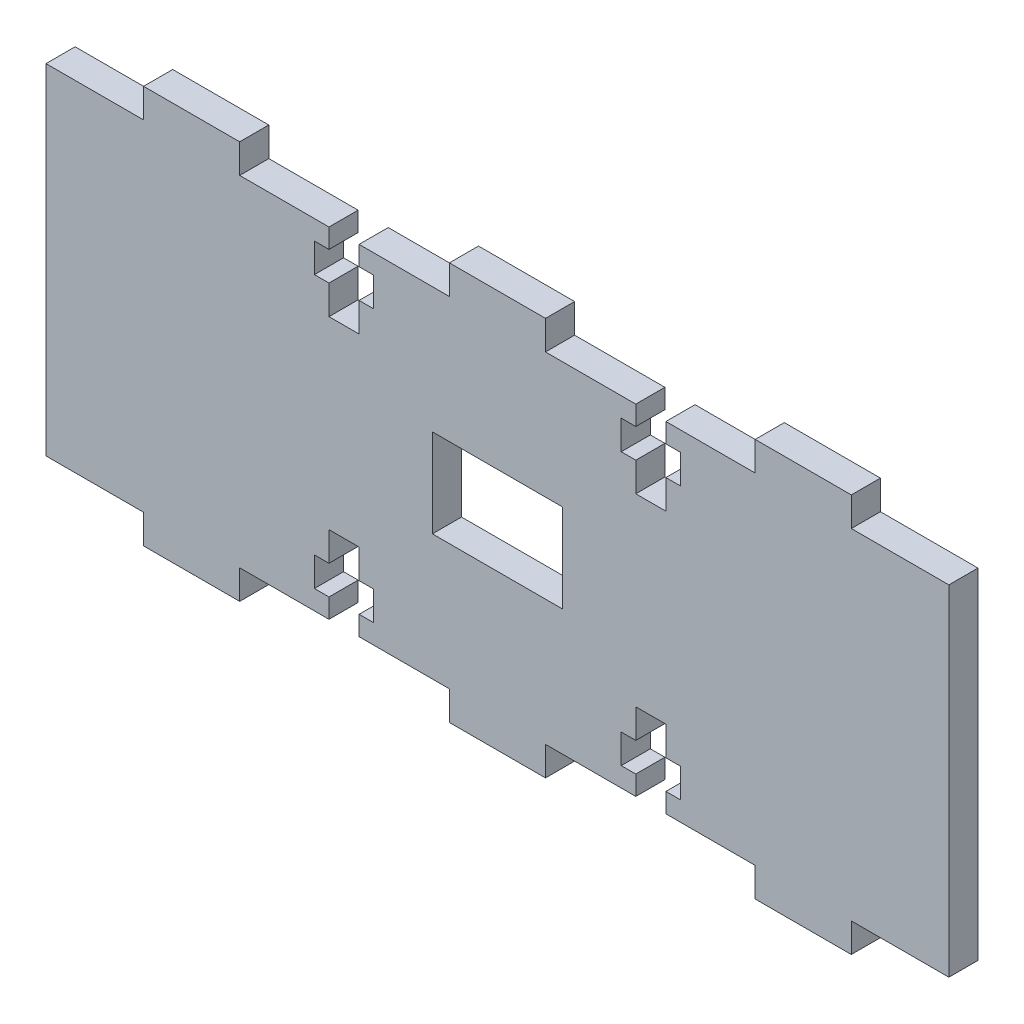
from build123d import *

# Parameters (mm, degrees)
RESSALTO_EXTRUS_O1_DEPTH = 3
CORTE_EXTRUS_O1_DEPTH    = 1.5
CORTE_EXTRUS_O2_DEPTH    = 1.5
ESBO_O5_W                = 13.4
ESBO_O5_H                = 9.1
CORTE_EXTRUS_O3_DEPTH    = 101.508706221
CORTE_EXTRUS_O4_DEPTH    = 2.5
ESBO_O8_W                = 1.020833333
ESBO_O8_H                = 3.5
CORTE_EXTRUS_O5_DEPTH    = 2


with BuildPart() as part:
    # Esboço1 → Ressalto-extrusão1 (new body)
    with BuildSketch(Plane.XY):
        Polygon((19.95, 35), (41.55, 35), (41.55, 38), (51.45, 38), (51.45, 35), (73.05, 35), (73.05, 38), (82.95, 38), (82.95, 35), (93, 35), (93, 0), (82.95, 0), (82.95, -3), (73.05, -3), (73.05, 0), (51.45, 0), (51.45, -3), (41.55, -3), (41.55, 0), (19.95, 0), (19.95, -3), (10.05, -3), (10.05, 0), (0, 0), (0, 35), (10.05, 35), (10.05, 38), (19.95, 38), align=None)
    extrude(amount=RESSALTO_EXTRUS_O1_DEPTH)

    # Esboço3 → Corte-extrusão1 (cut)
    # profile 1 of 9: a face of its own
    with BuildSketch(Plane(origin=(0, 0, 0), x_dir=(-1, 0, 0), z_dir=(0, 0, -1))):
        with BuildLine():
            add(Edge.make_bspline(
                [(-23.128976412, 3.488014365), (-23.162286257, 3.458458149), (-23.227749174, 3.400372133), (-23.33228279, 3.324046255), (-23.438267803, 3.25712929), (-23.546217033, 3.201791271), (-23.65408213, 3.158438479), (-23.760133786, 3.126002324), (-23.864468588, 3.106544621), (-23.93346993, 3.103975882), (-23.967310929, 3.10271607)],
                knots=[0, 0, 0, 0, 1.132791299, 2.226243438, 3.289696964, 4.320057693, 5.308833649, 6.244534104, 7.13904979, 8, 8, 8, 8], degree=3))
            add(Edge.make_bspline(
                [(-23.967310929, 3.10271607), (-23.985563836, 3.103213621), (-24.021370602, 3.104189667), (-24.073764096, 3.111264293), (-24.123664987, 3.122087651), (-24.170472819, 3.138439282), (-24.214365901, 3.159151613), (-24.255793298, 3.184100215), (-24.294280754, 3.214023152), (-24.329636453, 3.248229342), (-24.361643726, 3.286137126), (-24.388554938, 3.328077417), (-24.412794518, 3.372157838), (-24.431180952, 3.420180369), (-24.446183221, 3.47085242), (-24.456491294, 3.524985172), (-24.463787132, 3.581861254), (-24.46423968, 3.620979912), (-24.46447002, 3.640890786)],
                knots=[0, 0, 0, 0, 1.059677467, 2.078771626, 3.065179865, 4.020057187, 4.950993552, 5.879361598, 6.822574577, 7.775403861, 8.731871069, 9.696098328, 10.664817353, 11.647698496, 12.675488215, 13.730032385, 14.844616858, 16, 16, 16, 16], degree=3))
            add(Edge.make_bspline(
                [(-24.46447002, 3.640890786), (-24.463280835, 3.669342391), (-24.460727386, 3.730434415), (-24.441653121, 3.826822845), (-24.412742311, 3.934043037), (-24.372872313, 4.051516131), (-24.322079551, 4.177364155), (-24.26039295, 4.30982045), (-24.190791434, 4.449282733), (-24.137638246, 4.542448762), (-24.110244168, 4.590464649)],
                knots=[0, 0, 0, 0, 0.667548883, 1.433378268, 2.299057557, 3.273864952, 4.342872372, 5.48286519, 6.702719642, 8, 8, 8, 8], degree=3))
            add(Edge.make_bspline(
                [(-24.110244168, 4.590464649), (-24.116669031, 4.589659476), (-24.131611191, 4.587786902), (-24.14650102, 4.585534226), (-24.154988486, 4.584250161)],
                knots=[0, 0, 0, 0, 0.859964484, 2, 2, 2, 2], degree=3))
            add(Edge.make_bspline(
                [(-24.154988486, 4.584250161), (-24.167619588, 4.582751138), (-24.190792567, 4.580001037), (-24.222286147, 4.576942242), (-24.247349627, 4.574821978), (-24.261875014, 4.57446134), (-24.268092179, 4.574306979)],
                knots=[0, 0, 0, 0, 1.343744271, 2.465228863, 3.343086259, 4, 4, 4, 4], degree=3))
            add(Edge.make_bspline(
                [(-24.268092179, 4.574306979), (-24.294262321, 4.575213364), (-24.344132528, 4.576940584), (-24.414515223, 4.591136883), (-24.47625384, 4.614938183), (-24.528922031, 4.647738038), (-24.571672987, 4.689227656), (-24.602140936, 4.738763566), (-24.620082529, 4.795390285), (-24.622372983, 4.835184162), (-24.623560929, 4.855823314)],
                knots=[0, 0, 0, 0, 1.229380434, 2.34272545, 3.357143667, 4.324286646, 5.24006644, 6.13187441, 7.031093948, 8, 8, 8, 8], degree=3))
            add(Edge.make_bspline(
                [(-24.623560929, 4.855823314), (-24.622932434, 4.864963803), (-24.621519996, 4.885505528), (-24.613903046, 4.920038605), (-24.60093328, 4.962821352), (-24.589935119, 4.99424447), (-24.583788202, 5.011806979)],
                knots=[0, 0, 0, 0, 0.679762839, 1.527653611, 2.61819544, 4, 4, 4, 4], degree=3))
            add(Edge.make_bspline(
                [(-24.583788202, 5.011806979), (-24.549243321, 5.005686833), (-24.481398241, 4.993667054), (-24.380182963, 4.981361744), (-24.281681873, 4.973538852), (-24.216733055, 4.972529993), (-24.184818032, 4.972034252)],
                knots=[0, 0, 0, 0, 1.048383803, 2.058993469, 3.046214084, 4, 4, 4, 4], degree=3))
            add(Edge.make_bspline(
                [(-24.184818032, 4.972034252), (-24.156640894, 4.972686502), (-24.097330507, 4.974059431), (-24.020812679, 4.978859904), (-23.954019334, 4.986452172), (-23.897627126, 4.993164204), (-23.836359066, 5.00205695), (-23.793716265, 5.008472683), (-23.771554537, 5.011806979)],
                knots=[0, 0, 0, 0, 1.220764439, 2.569601277, 3.31866987, 4.132188538, 5.029286861, 6, 6, 6, 6], degree=3))
            add(Edge.make_bspline(
                [(-23.771554537, 5.011806979), (-23.737241704, 5.049356145), (-23.670986789, 5.12186012), (-23.56706404, 5.219315836), (-23.463291698, 5.301580431), (-23.360479899, 5.369671945), (-23.258057682, 5.422248532), (-23.157200871, 5.460824561), (-23.056954007, 5.48460766), (-22.990306579, 5.487603217), (-22.957456526, 5.489079706)],
                knots=[0, 0, 0, 0, 1.256557093, 2.426295825, 3.515880669, 4.525280049, 5.468433432, 6.354480487, 7.188934916, 8, 8, 8, 8], degree=3))
            add(Edge.make_bspline(
                [(-22.957456526, 5.489079706), (-22.933369645, 5.488090346), (-22.887464674, 5.486204816), (-22.822601143, 5.473079029), (-22.766413027, 5.449000588), (-22.719137856, 5.415787426), (-22.680999081, 5.374191497), (-22.653469172, 5.324246399), (-22.638149626, 5.266447886), (-22.636028422, 5.225674329), (-22.634924566, 5.204456127)],
                knots=[0, 0, 0, 0, 1.185998833, 2.260286085, 3.237987872, 4.174714172, 5.084508663, 5.992987141, 6.955568088, 8, 8, 8, 8], degree=3))
            add(Edge.make_bspline(
                [(-22.634924566, 5.204456127), (-22.635438256, 5.187829548), (-22.636443408, 5.155295836), (-22.646836086, 5.10793687), (-22.663685055, 5.063257106), (-22.687781094, 5.021439084), (-22.71770166, 4.98180249), (-22.755117905, 4.945654526), (-22.79879507, 4.911942498), (-22.8501114, 4.881392723), (-22.909663543, 4.85258172), (-22.97879612, 4.824790875), (-23.058252169, 4.798167079), (-23.148375422, 4.773958725), (-23.248201598, 4.748586904), (-23.359043826, 4.726097407), (-23.480102608, 4.704461583), (-23.56437871, 4.691190439), (-23.608113486, 4.684303428)],
                knots=[0, 0, 0, 0, 0.666825237, 1.304796404, 1.936718248, 2.57750369, 3.236393977, 3.924669282, 4.660143981, 5.447693611, 6.31830066, 7.314717079, 8.43803976, 9.68134614, 11.061436642, 12.573886214, 14.22203074, 16, 16, 16, 16], degree=3))
            add(Edge.make_bspline(
                [(-23.608113486, 4.684303428), (-23.633910641, 4.639944943), (-23.68383978, 4.554091253), (-23.751176465, 4.42646965), (-23.809012399, 4.304658383), (-23.857791542, 4.190045682), (-23.897427385, 4.084964823), (-23.924530799, 3.990969185), (-23.943402893, 3.909680017), (-23.946164743, 3.859098561), (-23.947424566, 3.836025729)],
                knots=[0, 0, 0, 0, 1.337019238, 2.587735718, 3.758758237, 4.849553216, 5.833225994, 6.682190883, 7.398878753, 8, 8, 8, 8], degree=3))
            add(Edge.make_bspline(
                [(-23.947424566, 3.836025729), (-23.946559185, 3.816704788), (-23.944912775, 3.779946176), (-23.933389645, 3.727844465), (-23.912642503, 3.683019708), (-23.884114032, 3.645109727), (-23.847425926, 3.61541515), (-23.80340314, 3.594974359), (-23.752999776, 3.582184362), (-23.717158391, 3.580747751), (-23.698223572, 3.579988797)],
                knots=[0, 0, 0, 0, 1.141127107, 2.171025185, 3.129001028, 4.036910243, 4.950326721, 5.88616812, 6.883273503, 8, 8, 8, 8], degree=3))
            add(Edge.make_bspline(
                [(-23.698223572, 3.579988797), (-23.675143288, 3.581162315), (-23.627829774, 3.583567974), (-23.556561489, 3.600706116), (-23.483899562, 3.627886155), (-23.409960917, 3.665453786), (-23.335569951, 3.713260145), (-23.262347156, 3.771792099), (-23.18909068, 3.838786873), (-23.143670438, 3.889467461), (-23.120276128, 3.915571183)],
                knots=[0, 0, 0, 0, 0.805205729, 1.650634488, 2.545128958, 3.508724317, 4.539630158, 5.625944801, 6.777210779, 8, 8, 8, 8], degree=3))
            add(Edge.make_bspline(
                [(-23.120276128, 3.915571183), (-23.097211046, 3.941645763), (-23.051461923, 3.993364161), (-22.988250299, 4.074459294), (-22.929257244, 4.157098786), (-22.885825681, 4.227929141), (-22.853093801, 4.281895029), (-22.830380688, 4.31667383), (-22.81104665, 4.347021889), (-22.792205632, 4.370648086), (-22.776761248, 4.390282453), (-22.762675879, 4.403523569), (-22.751066904, 4.413013186), (-22.743141387, 4.414583595), (-22.739949424, 4.41521607)],
                knots=[0, 0, 0, 0, 1.982306278, 3.93186422, 5.853409867, 7.761871261, 8.66234484, 9.447802691, 10.128438303, 10.708962604, 11.16970474, 11.545220123, 11.816839622, 12, 12, 12, 12], degree=3))
            add(Edge.make_bspline(
                [(-22.739949424, 4.41521607), (-22.722683891, 4.414550987), (-22.687954507, 4.413213181), (-22.636559628, 4.400534578), (-22.585468976, 4.381175143), (-22.537413273, 4.354337488), (-22.494318584, 4.325624307), (-22.46167317, 4.295424721), (-22.440444874, 4.264171856), (-22.43744309, 4.242066833), (-22.436060929, 4.231888655)],
                knots=[0, 0, 0, 0, 1.091768746, 2.19607796, 3.333934299, 4.543288668, 5.675078014, 6.60295972, 7.356737846, 8, 8, 8, 8], degree=3))
            add(Edge.make_bspline(
                [(-22.436060929, 4.231888655), (-22.436148487, 4.227938194), (-22.436357888, 4.218490395), (-22.440295906, 4.202475081), (-22.44407853, 4.181758183), (-22.451554559, 4.157144396), (-22.459317231, 4.127801332), (-22.469367223, 4.093989253), (-22.481877209, 4.056030398), (-22.490557507, 4.029094443), (-22.495098572, 4.015003002)],
                knots=[0, 0, 0, 0, 0.419979439, 1.004409777, 1.749047228, 2.664770346, 3.741185167, 4.984383253, 6.42239168, 8, 8, 8, 8], degree=3))
            add(Edge.make_bspline(
                [(-22.495098572, 4.015003002), (-22.502541481, 3.991383356), (-22.515733755, 3.949518433), (-22.529062471, 3.90769676), (-22.534871299, 3.889470331)],
                knots=[0, 0, 0, 0, 1.128374016, 2, 2, 2, 2], degree=3))
            add(Edge.make_bspline(
                [(-22.534871299, 3.889470331), (-22.541982136, 3.866911729), (-22.556698494, 3.820225178), (-22.578126467, 3.747560671), (-22.601266076, 3.670338106), (-22.625595452, 3.588393199), (-22.650350444, 3.501564392), (-22.675640643, 3.410100494), (-22.702675747, 3.314333679), (-22.729219554, 3.215830907), (-22.75527652, 3.119023976), (-22.780257014, 3.028589495), (-22.802420188, 2.946443806), (-22.82310533, 2.872746506), (-22.841725106, 2.807339231), (-22.85770389, 2.750055458), (-22.872034703, 2.701381518), (-22.881196129, 2.671835902), (-22.885368458, 2.658380132)],
                knots=[0, 0, 0, 0, 0.886895505, 1.835490197, 2.840629366, 3.909760374, 5.040731589, 6.226140985, 7.46809787, 8.772027383, 10.05143378, 11.22728677, 12.290050057, 13.241787955, 14.097487704, 14.840090738, 15.47175002, 16, 16, 16, 16], degree=3))
            add(Edge.make_bspline(
                [(-22.885368458, 2.658380132), (-22.901847578, 2.608692221), (-22.933925367, 2.511971135), (-22.989217284, 2.373627867), (-23.049764009, 2.246089047), (-23.113538143, 2.12810513), (-23.181964651, 2.020255758), (-23.25453175, 1.922320502), (-23.331719232, 1.834814608), (-23.413762842, 1.757698378), (-23.500749049, 1.690112158), (-23.592962421, 1.631289349), (-23.691206465, 1.582206403), (-23.794857377, 1.54137186), (-23.904493222, 1.510698399), (-24.019609932, 1.488323274), (-24.140139646, 1.474272677), (-24.222480472, 1.472788954), (-24.264363486, 1.472034252)],
                knots=[0, 0, 0, 0, 1.273483073, 2.478926202, 3.62194897, 4.706776958, 5.740024211, 6.726859014, 7.669431593, 8.575088604, 9.462255813, 10.345908622, 11.23171476, 12.130205302, 13.052344558, 13.997285684, 14.981310786, 16, 16, 16, 16], degree=3))
            add(Edge.make_bspline(
                [(-24.264363486, 1.472034252), (-24.292963705, 1.472541692), (-24.348797513, 1.473532325), (-24.430595928, 1.480382192), (-24.508310396, 1.491952963), (-24.581936432, 1.508987175), (-24.651912622, 1.529837621), (-24.717843056, 1.556206593), (-24.78030465, 1.586377269), (-24.837815123, 1.621754455), (-24.889916741, 1.660578807), (-24.935361548, 1.702351614), (-24.97462293, 1.745794511), (-25.00578997, 1.792533168), (-25.031197356, 1.841040129), (-25.048605841, 1.892403545), (-25.058692965, 1.946012224), (-25.060263535, 1.982408485), (-25.061060929, 2.000887235)],
                knots=[0, 0, 0, 0, 1.295245456, 2.528599123, 3.714806262, 4.850480839, 5.948603649, 7.018304411, 8.063070296, 9.086428349, 10.071527462, 11.001140365, 11.878435465, 12.716318123, 13.538720406, 14.351649676, 15.163115917, 16, 16, 16, 16], degree=3))
            add(Edge.make_bspline(
                [(-25.061060929, 2.000887235), (-25.060155481, 2.020205743), (-25.058394963, 2.057767862), (-25.046750783, 2.111981672), (-25.025743589, 2.161311847), (-24.997113922, 2.205405422), (-24.962001388, 2.243728006), (-24.919900508, 2.273046831), (-24.873241869, 2.295807264), (-24.839220264, 2.303383115), (-24.821803117, 2.307261524)],
                knots=[0, 0, 0, 0, 1.092606682, 2.124419802, 3.11663201, 4.107736991, 5.085808345, 6.035038477, 6.994050296, 8, 8, 8, 8], degree=3))
            add(Edge.make_bspline(
                [(-24.821803117, 2.307261524), (-24.806613227, 2.273723905), (-24.777821528, 2.210154978), (-24.725126003, 2.125640026), (-24.669513588, 2.055526913), (-24.60830579, 1.99993631), (-24.54009229, 1.958586959), (-24.464201367, 1.930156638), (-24.380578294, 1.912229343), (-24.322047314, 1.910454341), (-24.291707236, 1.909534252)],
                knots=[0, 0, 0, 0, 1.241428273, 2.353066974, 3.35215795, 4.253267298, 5.128566344, 6.027068184, 6.977312431, 8, 8, 8, 8], degree=3))
            add(Edge.make_bspline(
                [(-24.291707236, 1.909534252), (-24.257046038, 1.910604016), (-24.188994211, 1.912704331), (-24.089552151, 1.929391162), (-23.995054385, 1.955793509), (-23.90587511, 1.994145051), (-23.822394831, 2.043819922), (-23.743269142, 2.103252924), (-23.669656403, 2.173989114), (-23.601134796, 2.257040081), (-23.535976949, 2.353770612), (-23.472803708, 2.466051283), (-23.411521149, 2.595418439), (-23.351806537, 2.741463808), (-23.29256693, 2.904086643), (-23.235986986, 3.083595088), (-23.180517783, 3.279877638), (-23.146597229, 3.416857176), (-23.128976412, 3.488014365)],
                knots=[0, 0, 0, 0, 0.781307524, 1.533974778, 2.267447953, 2.989449946, 3.716152247, 4.45335028, 5.216613731, 6.012752978, 6.877019124, 7.843554938, 8.915506006, 10.103204731, 11.400779762, 12.817663708, 14.346861825, 16, 16, 16, 16], degree=3))
        make_face()
    # profile 2 of 9: a face of its own
    with BuildSketch(Plane(origin=(0, 0, 0), x_dir=(-1, 0, 0), z_dir=(0, 0, -1))):
        with BuildLine():
            add(Edge.make_bspline(
                [(-20.812836498, 2.951082547), (-20.83150126, 2.91906992), (-20.867796467, 2.856818661), (-20.923929982, 2.76767785), (-20.979630319, 2.684999972), (-21.03550189, 2.609023008), (-21.09162149, 2.539874153), (-21.147289735, 2.476925308), (-21.203245896, 2.421040316), (-21.258790096, 2.371294983), (-21.315014182, 2.328279589), (-21.371778745, 2.29067948), (-21.429571609, 2.258600289), (-21.488984121, 2.233480569), (-21.54874878, 2.212355107), (-21.609810049, 2.198154597), (-21.671872804, 2.190019096), (-21.713499764, 2.188638178), (-21.734445162, 2.187943342)],
                knots=[0, 0, 0, 0, 1.41713235, 2.755733618, 4.027985297, 5.229056039, 6.361180788, 7.432930047, 8.441284659, 9.384081408, 10.282529831, 11.146069474, 11.986364984, 12.806092288, 13.61032138, 14.407810567, 15.198859521, 16, 16, 16, 16], degree=3))
            add(Edge.make_bspline(
                [(-21.734445162, 2.187943342), (-21.753732524, 2.188209197), (-21.7913782, 2.188728099), (-21.845726376, 2.195389824), (-21.896808561, 2.204295033), (-21.943651254, 2.21788325), (-21.986368556, 2.235073055), (-22.023790725, 2.256655288), (-22.057525131, 2.28029198), (-22.075522524, 2.300075695), (-22.084320873, 2.30974732)],
                knots=[0, 0, 0, 0, 1.211657793, 2.364951658, 3.437651253, 4.467938575, 5.425550467, 6.323583087, 7.18045348, 8, 8, 8, 8], degree=3))
            add(Edge.make_bspline(
                [(-22.084320873, 2.30974732), (-22.102018373, 2.300795537), (-22.137880557, 2.28265566), (-22.195020066, 2.259618379), (-22.255719883, 2.239969354), (-22.320232289, 2.223115609), (-22.389055734, 2.209117468), (-22.4634944, 2.199985161), (-22.543394564, 2.19117341), (-22.598854613, 2.189042636), (-22.627467179, 2.187943342)],
                knots=[0, 0, 0, 0, 0.847352477, 1.71707361, 2.629803218, 3.572527281, 4.565702149, 5.628752451, 6.776642321, 8, 8, 8, 8], degree=3))
            Line((-22.627467179, 2.187943342), (-22.543571583, 2.466352433))
            add(Edge.make_bspline(
                [(-22.543571583, 2.466352433), (-22.5078338, 2.469738762), (-22.439949922, 2.476171089), (-22.343513337, 2.49730839), (-22.256961029, 2.529065884), (-22.206121387, 2.559988521), (-22.181266895, 2.575105985)],
                knots=[0, 0, 0, 0, 1.125116277, 2.137157076, 3.089293074, 4, 4, 4, 4], degree=3))
            add(Edge.make_bspline(
                [(-22.181266895, 2.575105985), (-22.183607916, 2.5900093), (-22.188376822, 2.620368935), (-22.194497633, 2.667132641), (-22.196361573, 2.716784034), (-22.197061812, 2.750770276), (-22.197424566, 2.768376581)],
                knots=[0, 0, 0, 0, 0.932298803, 1.89919158, 2.911692694, 4, 4, 4, 4], degree=3))
            add(Edge.make_bspline(
                [(-22.197424566, 2.768376581), (-22.196378369, 2.79825905), (-22.194231344, 2.8595844), (-22.178979444, 2.953345453), (-22.155266262, 3.050971413), (-22.122327938, 3.151980196), (-22.080188081, 3.254193577), (-22.030118771, 3.35636929), (-21.973234234, 3.457898833), (-21.929802894, 3.523289976), (-21.907829395, 3.55637374)],
                knots=[0, 0, 0, 0, 0.842413399, 1.728816239, 2.672346005, 3.673508823, 4.721328665, 5.787162813, 6.880444977, 8, 8, 8, 8], degree=3))
            add(Edge.make_bspline(
                [(-21.907829395, 3.55637374), (-21.890270326, 3.581011135), (-21.855601865, 3.629654977), (-21.799975261, 3.698159012), (-21.744360086, 3.763327637), (-21.686276582, 3.823117628), (-21.626648361, 3.878145352), (-21.566240981, 3.92960404), (-21.504241894, 3.976178479), (-21.440582138, 4.017849777), (-21.376165358, 4.055217871), (-21.310915157, 4.087439346), (-21.245252069, 4.115221404), (-21.178914838, 4.137376712), (-21.111906958, 4.155111082), (-21.044366914, 4.167328123), (-20.97625511, 4.175167176), (-20.930725757, 4.176108272), (-20.907918174, 4.176579706)],
                knots=[0, 0, 0, 0, 1.186153363, 2.341930115, 3.459209786, 4.545007079, 5.608451121, 6.640273187, 7.655720179, 8.647096038, 9.622466571, 10.574312588, 11.499152363, 12.416253357, 13.314744359, 14.21499639, 15.105816037, 16, 16, 16, 16], degree=3))
            add(Edge.make_bspline(
                [(-20.907918174, 4.176579706), (-20.885728308, 4.176180488), (-20.842845835, 4.175408988), (-20.780965977, 4.16730108), (-20.723952399, 4.153543043), (-20.670935787, 4.134793818), (-20.620819481, 4.110062845), (-20.573028116, 4.07877626), (-20.526627687, 4.041026409), (-20.497728589, 4.012362673), (-20.482847151, 3.997602433)],
                knots=[0, 0, 0, 0, 1.118185034, 2.16092069, 3.138613916, 4.070094984, 4.990149296, 5.948919817, 6.943807122, 8, 8, 8, 8], degree=3))
            Line((-20.482847151, 3.997602433), (-20.454260503, 4.098277149))
            add(Edge.make_bspline(
                [(-20.454260503, 4.098277149), (-20.449818406, 4.10991941), (-20.44170999, 4.131170701), (-20.429035628, 4.159685168), (-20.415674331, 4.180882627), (-20.397454836, 4.200949615), (-20.365353734, 4.214505324), (-20.338165127, 4.215694845), (-20.323134793, 4.216352433)],
                knots=[0, 0, 0, 0, 1.157865437, 2.113518687, 2.892856466, 3.478151273, 4.605878201, 6, 6, 6, 6], degree=3))
            add(Edge.make_bspline(
                [(-20.323134793, 4.216352433), (-20.300338144, 4.215630112), (-20.255842973, 4.214220265), (-20.191231741, 4.206952411), (-20.131597182, 4.191110545), (-20.077275925, 4.172642879), (-20.032183746, 4.148610499), (-19.996640203, 4.124215769), (-19.975012106, 4.09410309), (-19.971706408, 4.072426811), (-19.970151839, 4.062233115)],
                knots=[0, 0, 0, 0, 1.327369508, 2.590798952, 3.771960221, 4.91205547, 5.920395248, 6.737707887, 7.40638231, 8, 8, 8, 8], degree=3))
            add(Edge.make_bspline(
                [(-19.970151839, 4.062233115), (-19.970498002, 4.059730968), (-19.971474032, 4.052676006), (-19.976356275, 4.040165674), (-19.98318819, 4.022591197), (-19.992523928, 4.000109624), (-20.005059766, 3.972808019), (-20.020540651, 3.940767025), (-20.038862123, 3.903833827), (-20.079306413, 3.819863031), (-20.141583033, 3.694884171), (-20.190632502, 3.581042521), (-20.214381242, 3.525922746)],
                knots=[0, 0, 0, 0, 0.128189102, 0.361437295, 0.678426548, 1.089372641, 1.598652695, 2.20661569, 2.89934351, 3.695782221, 6.947628007, 10, 10, 10, 10], degree=3))
            add(Edge.make_bspline(
                [(-20.214381242, 3.525922746), (-20.23574671, 3.474852272), (-20.276755076, 3.37682883), (-20.331871628, 3.234610372), (-20.379651134, 3.10410775), (-20.418126216, 2.985103851), (-20.448400888, 2.878405524), (-20.469463153, 2.784415169), (-20.484013643, 2.703567228), (-20.486204152, 2.653662409), (-20.487197293, 2.631036382)],
                knots=[0, 0, 0, 0, 1.413671382, 2.71336695, 3.894790532, 4.962122974, 5.906778497, 6.725575122, 7.422196658, 8, 8, 8, 8], degree=3))
            add(Edge.make_bspline(
                [(-20.487197293, 2.631036382), (-20.486796414, 2.617894259), (-20.486050428, 2.593438364), (-20.475657876, 2.560166877), (-20.460042465, 2.53258277), (-20.435182624, 2.510457682), (-20.397440939, 2.496441325), (-20.347011302, 2.482874398), (-20.279864898, 2.472447812), (-20.229731563, 2.467326081), (-20.201952265, 2.464488087)],
                knots=[0, 0, 0, 0, 0.83993817, 1.563022821, 2.212630817, 2.852788969, 3.650333328, 4.765869832, 6.207941549, 8, 8, 8, 8], degree=3))
            Line((-20.201952265, 2.464488087), (-20.282119168, 2.187943342))
            Line((-20.282119168, 2.187943342), (-20.318784651, 2.187943342))
            add(Edge.make_bspline(
                [(-20.318784651, 2.187943342), (-20.345508459, 2.188233393), (-20.397110203, 2.18879346), (-20.471342395, 2.19159934), (-20.539302575, 2.197371221), (-20.601178518, 2.204458427), (-20.656921144, 2.214527489), (-20.706764884, 2.225758898), (-20.75007004, 2.240364296), (-20.787814969, 2.256208004), (-20.820519176, 2.275285952), (-20.848398073, 2.297460801), (-20.871881107, 2.322956867), (-20.891389817, 2.351062915), (-20.906469742, 2.382545317), (-20.916640775, 2.416987762), (-20.924137417, 2.454225549), (-20.924505709, 2.480189719), (-20.924697293, 2.493696183)],
                knots=[0, 0, 0, 0, 1.672782946, 3.230023134, 4.64809941, 5.941104058, 7.126318427, 8.192431234, 9.135461276, 9.983306427, 10.750480201, 11.497672057, 12.204156807, 12.912661276, 13.631763874, 14.37816785, 15.156329004, 16, 16, 16, 16], degree=3))
            add(Edge.make_bspline(
                [(-20.924697293, 2.493696183), (-20.924197157, 2.506752848), (-20.923139175, 2.534372773), (-20.91890005, 2.577822122), (-20.910390188, 2.625234564), (-20.899020439, 2.677475486), (-20.884079156, 2.735848187), (-20.863650597, 2.800844812), (-20.84029518, 2.873718882), (-20.822303694, 2.924409127), (-20.812836498, 2.951082547)],
                knots=[0, 0, 0, 0, 0.663116788, 1.402749925, 2.213400254, 3.106326523, 4.116139206, 5.270211821, 6.563573977, 8, 8, 8, 8], degree=3))
        make_face()
        with BuildLine():
            add(Edge.make_bspline(
                [(-20.5928436, 3.734108115), (-20.611496203, 3.747436034), (-20.647238017, 3.772974777), (-20.705380612, 3.798887746), (-20.763178615, 3.815940725), (-20.802155221, 3.817733622), (-20.821536782, 3.818625161)],
                knots=[0, 0, 0, 0, 1.105973929, 2.119249291, 3.064775275, 4, 4, 4, 4], degree=3))
            add(Edge.make_bspline(
                [(-20.821536782, 3.818625161), (-20.843399378, 3.817077493), (-20.889327176, 3.813826235), (-20.960144747, 3.79322619), (-21.034559652, 3.758557498), (-21.113275226, 3.71292165), (-21.193516221, 3.6561123), (-21.272260931, 3.588271093), (-21.35054077, 3.512162785), (-21.398516504, 3.455105596), (-21.423099282, 3.425869479)],
                knots=[0, 0, 0, 0, 0.711625276, 1.49494514, 2.381928831, 3.378519747, 4.452016458, 5.575740207, 6.757808725, 8, 8, 8, 8], degree=3))
            add(Edge.make_bspline(
                [(-21.423099282, 3.425869479), (-21.445080914, 3.398015966), (-21.488748978, 3.342682998), (-21.545979461, 3.254776813), (-21.597683812, 3.165128308), (-21.640403163, 3.073669792), (-21.674779055, 2.984050809), (-21.701014418, 2.899367967), (-21.716877239, 2.81993121), (-21.719093061, 2.76864565), (-21.720151839, 2.744140075)],
                knots=[0, 0, 0, 0, 1.126007581, 2.236893531, 3.326748867, 4.409456619, 5.437889094, 6.372104199, 7.222149026, 8, 8, 8, 8], degree=3))
            add(Edge.make_bspline(
                [(-21.720151839, 2.744140075), (-21.719687548, 2.728369229), (-21.718815061, 2.698732923), (-21.712168336, 2.657513285), (-21.701285703, 2.622679029), (-21.68560252, 2.594138588), (-21.664447641, 2.572076428), (-21.637850779, 2.556996125), (-21.606862837, 2.547412199), (-21.584544538, 2.54641801), (-21.572868458, 2.545897888)],
                knots=[0, 0, 0, 0, 1.341506644, 2.520936449, 3.541020893, 4.433058863, 5.268251629, 6.105673561, 7.008960877, 8, 8, 8, 8], degree=3))
            add(Edge.make_bspline(
                [(-21.572868458, 2.545897888), (-21.555190024, 2.547021368), (-21.518728937, 2.549338504), (-21.463627798, 2.563483137), (-21.407872425, 2.587818334), (-21.351079053, 2.621447583), (-21.292439181, 2.663655636), (-21.233860052, 2.716812502), (-21.172477849, 2.777474503), (-21.111354379, 2.848906764), (-21.048937635, 2.928875693), (-20.985228732, 3.017433), (-20.921440882, 3.115380314), (-20.85642192, 3.221812823), (-20.790962521, 3.337274239), (-20.725516049, 3.461733513), (-20.658038058, 3.594380626), (-20.614942321, 3.686745212), (-20.5928436, 3.734108115)],
                knots=[0, 0, 0, 0, 0.531603846, 1.096412419, 1.698983147, 2.354705384, 3.077103607, 3.866710016, 4.729679051, 5.669820042, 6.689964266, 7.778612698, 8.947797, 10.202570351, 11.527105327, 12.936529603, 14.429107306, 16, 16, 16, 16], degree=3))
        make_face(mode=Mode.SUBTRACT)
    # profile 3 of 9: a face of its own
    with BuildSketch(Plane(origin=(0, 0, 0), x_dir=(-1, 0, 0), z_dir=(0, 0, -1))):
        with BuildLine():
            Line((-20.288333657, 2.187943342), (-20.206923856, 2.466352433))
            add(Edge.make_bspline(
                [(-20.206923856, 2.466352433), (-20.185626427, 2.470727238), (-20.142586226, 2.479568328), (-20.080227311, 2.50414843), (-20.018793484, 2.535918845), (-19.959155792, 2.576658999), (-19.901181273, 2.625666242), (-19.844345808, 2.68255813), (-19.789294912, 2.748135223), (-19.73428878, 2.822721958), (-19.679519899, 2.908900831), (-19.622759946, 3.008156373), (-19.564942271, 3.122188774), (-19.503767822, 3.249957652), (-19.442344014, 3.392913104), (-19.376616875, 3.549094152), (-19.310566788, 3.72037568), (-19.266523159, 3.83949284), (-19.243678117, 3.90127786)],
                knots=[0, 0, 0, 0, 0.580460055, 1.173057935, 1.785041924, 2.427266557, 3.099649617, 3.812547883, 4.575030479, 5.387149511, 6.289137188, 7.303971366, 8.443616531, 9.707304388, 11.091527492, 12.603813088, 14.238427849, 16, 16, 16, 16], degree=3))
            add(Edge.make_bspline(
                [(-19.243678117, 3.90127786), (-19.257640983, 3.917764749), (-19.28529106, 3.950413044), (-19.314533534, 4.008622103), (-19.330733228, 4.073781566), (-19.332742151, 4.119313095), (-19.333788202, 4.143021467)],
                knots=[0, 0, 0, 0, 0.977621577, 1.93594294, 2.925240705, 4, 4, 4, 4], degree=3))
            add(Edge.make_bspline(
                [(-19.333788202, 4.143021467), (-19.332690048, 4.167339656), (-19.330572699, 4.214227499), (-19.31495305, 4.281579991), (-19.287722294, 4.342187308), (-19.25077182, 4.395493072), (-19.205322549, 4.439257787), (-19.153563078, 4.472016068), (-19.095233765, 4.491433542), (-19.054487392, 4.493634701), (-19.033628401, 4.494761524)],
                knots=[0, 0, 0, 0, 1.13059715, 2.179901732, 3.193385099, 4.203703544, 5.178148935, 6.108539584, 7.031718569, 8, 8, 8, 8], degree=3))
            add(Edge.make_bspline(
                [(-19.033628401, 4.494761524), (-19.014700589, 4.494197007), (-18.97870714, 4.493123512), (-18.927763831, 4.480903739), (-18.882765651, 4.461304012), (-18.845248144, 4.432567199), (-18.814152978, 4.398669532), (-18.792723881, 4.357952922), (-18.779121989, 4.31229938), (-18.777706369, 4.279843388), (-18.77697002, 4.262961098)],
                knots=[0, 0, 0, 0, 1.162023977, 2.209724611, 3.202034093, 4.157671193, 5.096251923, 6.00842799, 6.964065091, 8, 8, 8, 8], degree=3))
            add(Edge.make_bspline(
                [(-18.77697002, 4.262961098), (-18.777570089, 4.246758138), (-18.778740824, 4.215146142), (-18.787818024, 4.169220224), (-18.802325401, 4.124463343), (-18.817114309, 4.096626642), (-18.824821583, 4.082119479)],
                knots=[0, 0, 0, 0, 1.027135333, 2.003942297, 2.959749815, 4, 4, 4, 4], degree=3))
            add(Edge.make_bspline(
                [(-18.824821583, 4.082119479), (-18.806452322, 4.070204515), (-18.767336694, 4.04483271), (-18.703852385, 4.006910763), (-18.63349941, 3.964177146), (-18.583748342, 3.935168582), (-18.557598572, 3.919921325)],
                knots=[0, 0, 0, 0, 0.840364472, 1.789477753, 2.838122404, 4, 4, 4, 4], degree=3))
            add(Edge.make_bspline(
                [(-18.557598572, 3.919921325), (-18.534270629, 3.906258413), (-18.489823675, 3.880226335), (-18.428424258, 3.839752812), (-18.377389202, 3.797904915), (-18.334894111, 3.756722807), (-18.301497001, 3.715435224), (-18.27810816, 3.673588922), (-18.262275541, 3.632069067), (-18.260694601, 3.603733503), (-18.259924566, 3.589931979)],
                knots=[0, 0, 0, 0, 1.399656898, 2.666779754, 3.802409937, 4.811023803, 5.727197765, 6.538651496, 7.28821477, 8, 8, 8, 8], degree=3))
            add(Edge.make_bspline(
                [(-18.259924566, 3.589931979), (-18.260495042, 3.57726982), (-18.261746693, 3.54948848), (-18.269859479, 3.504836961), (-18.282603575, 3.453471593), (-18.300009826, 3.395395806), (-18.322522577, 3.330757674), (-18.35028636, 3.259629032), (-18.382295894, 3.181587522), (-18.41906289, 3.099628485), (-18.455397865, 3.017904283), (-18.487929788, 2.940702866), (-18.515210262, 2.87063418), (-18.538011123, 2.807563256), (-18.555392403, 2.751339928), (-18.568051374, 2.70203728), (-18.576219173, 2.659890587), (-18.577522093, 2.633963182), (-18.578106384, 2.622336098)],
                knots=[0, 0, 0, 0, 0.593753621, 1.302721942, 2.122519609, 3.075167166, 4.144105503, 5.330977034, 6.654914819, 8.098696586, 9.542478352, 10.848480633, 12.026296055, 13.06774261, 13.992501737, 14.784020952, 15.454697076, 16, 16, 16, 16], degree=3))
            add(Edge.make_bspline(
                [(-18.578106384, 2.622336098), (-18.577341655, 2.61068231), (-18.575889918, 2.588559152), (-18.566345306, 2.557501421), (-18.547869312, 2.533100234), (-18.527223547, 2.516951246), (-18.505254918, 2.507869287), (-18.483354675, 2.500258565), (-18.455856322, 2.493668526), (-18.422820793, 2.487663182), (-18.384472382, 2.481556951), (-18.340806334, 2.475151556), (-18.291644349, 2.469824728), (-18.25702637, 2.466329041), (-18.238795304, 2.464488087)],
                knots=[0, 0, 0, 0, 1.009873831, 1.917110325, 2.763476157, 3.620600109, 4.150394859, 4.813835777, 5.627073798, 6.59417604, 7.720255358, 8.988156903, 10.413855673, 12, 12, 12, 12], degree=3))
            Line((-18.238795304, 2.464488087), (-18.31771931, 2.187943342))
            Line((-18.31771931, 2.187943342), (-18.377378401, 2.187943342))
            add(Edge.make_bspline(
                [(-18.377378401, 2.187943342), (-18.408042653, 2.188107001), (-18.467333395, 2.188423442), (-18.552934463, 2.19294411), (-18.631917681, 2.199655892), (-18.704175529, 2.20863073), (-18.769520665, 2.221058447), (-18.828272879, 2.23594604), (-18.880694486, 2.252930095), (-18.926597599, 2.27346628), (-18.966402928, 2.297367763), (-19.000778491, 2.32430078), (-19.031010246, 2.353991149), (-19.053362741, 2.389007683), (-19.072933481, 2.425843895), (-19.085467125, 2.466757946), (-19.094067436, 2.510734373), (-19.094782429, 2.541294668), (-19.095151839, 2.557083967)],
                knots=[0, 0, 0, 0, 1.620019478, 3.132382173, 4.52761136, 5.807811268, 6.977706509, 8.039548338, 9.008666876, 9.885503591, 10.690766849, 11.454886964, 12.190164905, 12.915684082, 13.640129211, 14.387766988, 15.167022738, 16, 16, 16, 16], degree=3))
            add(Edge.make_bspline(
                [(-19.095151839, 2.557083967), (-19.094644344, 2.572441145), (-19.093561534, 2.605207848), (-19.084855626, 2.656764354), (-19.070837809, 2.713497022), (-19.052069035, 2.775477925), (-19.028596096, 2.842895426), (-18.998124745, 2.914836317), (-18.963388331, 2.992567992), (-18.924611445, 3.073371305), (-18.884972684, 3.152480707), (-18.849979042, 3.226577229), (-18.82080927, 3.293203939), (-18.796389337, 3.351900239), (-18.777555687, 3.403144788), (-18.763783747, 3.446366742), (-18.754616867, 3.482044626), (-18.753305251, 3.503513835), (-18.752733515, 3.51287232)],
                knots=[0, 0, 0, 0, 0.721162189, 1.538701248, 2.449754251, 3.465724365, 4.579854446, 5.801501609, 7.134395801, 8.579475087, 10.011289085, 11.291121415, 12.428385274, 13.427721354, 14.277408655, 14.991444821, 15.560368112, 16, 16, 16, 16], degree=3))
            add(Edge.make_bspline(
                [(-18.752733515, 3.51287232), (-18.753518566, 3.520664018), (-18.755184264, 3.537196192), (-18.767830061, 3.561064081), (-18.785960365, 3.585876423), (-18.813621614, 3.60984818), (-18.848132122, 3.637359412), (-18.893607804, 3.665809044), (-18.948162793, 3.699131129), (-18.988763846, 3.721055183), (-19.010634793, 3.732865217)],
                knots=[0, 0, 0, 0, 0.531749333, 1.128248611, 1.817708076, 2.630794068, 3.621196171, 4.840969533, 6.298295693, 8, 8, 8, 8], degree=3))
            add(Edge.make_bspline(
                [(-19.010634793, 3.732865217), (-19.033389891, 3.667449389), (-19.077480666, 3.540698253), (-19.148740385, 3.359455909), (-19.219170176, 3.191927351), (-19.29054988, 3.038864951), (-19.362395394, 2.899966365), (-19.435191796, 2.775301535), (-19.50791373, 2.664362737), (-19.582673506, 2.56748808), (-19.658887932, 2.482658828), (-19.738067922, 2.408692574), (-19.821028847, 2.34538949), (-19.907904916, 2.293106892), (-19.997840465, 2.250186309), (-20.091525707, 2.218573643), (-20.188656528, 2.196876489), (-20.254879565, 2.190941526), (-20.288333657, 2.187943342)],
                knots=[0, 0, 0, 0, 1.561393245, 3.025389593, 4.389882194, 5.658135855, 6.832110206, 7.914277168, 8.911683515, 9.820632272, 10.670447767, 11.480094428, 12.260060786, 13.01857603, 13.762324761, 14.502265818, 15.243385078, 16, 16, 16, 16], degree=3))
        make_face()
    # profile 4 of 9: a face of its own
    with BuildSketch(Plane(origin=(0, 0, 0), x_dir=(-1, 0, 0), z_dir=(0, 0, -1))):
        with BuildLine():
            add(Edge.make_bspline(
                [(-16.477609225, 2.951082547), (-16.496273987, 2.91906992), (-16.532569195, 2.856818661), (-16.588702709, 2.76767785), (-16.644403046, 2.684999972), (-16.700274617, 2.609023008), (-16.756394217, 2.539874153), (-16.812062462, 2.476925308), (-16.868018623, 2.421040316), (-16.923562823, 2.371294983), (-16.97978691, 2.328279589), (-17.036551472, 2.29067948), (-17.094344336, 2.258600289), (-17.153756849, 2.233480569), (-17.213521507, 2.212355107), (-17.274582776, 2.198154597), (-17.336645532, 2.190019096), (-17.378272491, 2.188638178), (-17.39921789, 2.187943342)],
                knots=[0, 0, 0, 0, 1.41713235, 2.755733618, 4.027985297, 5.229056039, 6.361180788, 7.432930047, 8.441284659, 9.384081408, 10.282529831, 11.146069474, 11.986364984, 12.806092288, 13.61032138, 14.407810567, 15.198859521, 16, 16, 16, 16], degree=3))
            add(Edge.make_bspline(
                [(-17.39921789, 2.187943342), (-17.418505251, 2.188209197), (-17.456150928, 2.188728099), (-17.510499104, 2.195389824), (-17.561581288, 2.204295033), (-17.608423981, 2.21788325), (-17.651141284, 2.235073055), (-17.688563453, 2.256655288), (-17.722297858, 2.28029198), (-17.740295251, 2.300075695), (-17.7490936, 2.30974732)],
                knots=[0, 0, 0, 0, 1.211657793, 2.364951658, 3.437651253, 4.467938575, 5.425550467, 6.323583087, 7.18045348, 8, 8, 8, 8], degree=3))
            add(Edge.make_bspline(
                [(-17.7490936, 2.30974732), (-17.7667911, 2.300795537), (-17.802653284, 2.28265566), (-17.859792793, 2.259618379), (-17.92049261, 2.239969354), (-17.985005016, 2.223115609), (-18.053828461, 2.209117468), (-18.128267127, 2.199985161), (-18.208167291, 2.19117341), (-18.263627341, 2.189042636), (-18.292239907, 2.187943342)],
                knots=[0, 0, 0, 0, 0.847352477, 1.71707361, 2.629803218, 3.572527281, 4.565702149, 5.628752451, 6.776642321, 8, 8, 8, 8], degree=3))
            Line((-18.292239907, 2.187943342), (-18.20834431, 2.466352433))
            add(Edge.make_bspline(
                [(-18.20834431, 2.466352433), (-18.172606527, 2.469738762), (-18.10472265, 2.476171089), (-18.008286064, 2.49730839), (-17.921733756, 2.529065884), (-17.870894114, 2.559988521), (-17.846039623, 2.575105985)],
                knots=[0, 0, 0, 0, 1.125116277, 2.137157076, 3.089293074, 4, 4, 4, 4], degree=3))
            add(Edge.make_bspline(
                [(-17.846039623, 2.575105985), (-17.848380643, 2.5900093), (-17.853149549, 2.620368935), (-17.859270361, 2.667132641), (-17.861134301, 2.716784034), (-17.86183454, 2.750770276), (-17.862197293, 2.768376581)],
                knots=[0, 0, 0, 0, 0.932298803, 1.89919158, 2.911692694, 4, 4, 4, 4], degree=3))
            add(Edge.make_bspline(
                [(-17.862197293, 2.768376581), (-17.861151096, 2.79825905), (-17.859004071, 2.8595844), (-17.843752171, 2.953345453), (-17.82003899, 3.050971413), (-17.787100665, 3.151980196), (-17.744960808, 3.254193577), (-17.694891498, 3.35636929), (-17.638006961, 3.457898833), (-17.594575621, 3.523289976), (-17.572602123, 3.55637374)],
                knots=[0, 0, 0, 0, 0.842413399, 1.728816239, 2.672346005, 3.673508823, 4.721328665, 5.787162813, 6.880444977, 8, 8, 8, 8], degree=3))
            add(Edge.make_bspline(
                [(-17.572602123, 3.55637374), (-17.555043054, 3.581011135), (-17.520374592, 3.629654977), (-17.464747988, 3.698159012), (-17.409132814, 3.763327637), (-17.351049309, 3.823117628), (-17.291421089, 3.878145352), (-17.231013708, 3.92960404), (-17.169014621, 3.976178479), (-17.105354865, 4.017849777), (-17.040938086, 4.055217871), (-16.975687884, 4.087439346), (-16.910024796, 4.115221404), (-16.843687565, 4.137376712), (-16.776679685, 4.155111082), (-16.709139642, 4.167328123), (-16.641027837, 4.175167176), (-16.595498484, 4.176108272), (-16.572690901, 4.176579706)],
                knots=[0, 0, 0, 0, 1.186153363, 2.341930115, 3.459209786, 4.545007079, 5.608451121, 6.640273187, 7.655720179, 8.647096038, 9.622466571, 10.574312588, 11.499152363, 12.416253357, 13.314744359, 14.21499639, 15.105816037, 16, 16, 16, 16], degree=3))
            add(Edge.make_bspline(
                [(-16.572690901, 4.176579706), (-16.550501036, 4.176180488), (-16.507618562, 4.175408988), (-16.445738705, 4.16730108), (-16.388725126, 4.153543043), (-16.335708514, 4.134793818), (-16.285592208, 4.110062845), (-16.237800843, 4.07877626), (-16.191400414, 4.041026409), (-16.162501316, 4.012362673), (-16.147619878, 3.997602433)],
                knots=[0, 0, 0, 0, 1.118185034, 2.16092069, 3.138613916, 4.070094984, 4.990149296, 5.948919817, 6.943807122, 8, 8, 8, 8], degree=3))
            Line((-16.147619878, 3.997602433), (-16.119033231, 4.098277149))
            add(Edge.make_bspline(
                [(-16.119033231, 4.098277149), (-16.114591134, 4.10991941), (-16.106482718, 4.131170701), (-16.093808356, 4.159685168), (-16.080447058, 4.180882627), (-16.062227563, 4.200949615), (-16.030126461, 4.214505324), (-16.002937855, 4.215694845), (-15.98790752, 4.216352433)],
                knots=[0, 0, 0, 0, 1.157865437, 2.113518687, 2.892856466, 3.478151273, 4.605878201, 6, 6, 6, 6], degree=3))
            add(Edge.make_bspline(
                [(-15.98790752, 4.216352433), (-15.965110872, 4.215630112), (-15.9206157, 4.214220265), (-15.856004468, 4.206952411), (-15.796369909, 4.191110545), (-15.742048652, 4.172642879), (-15.696956474, 4.148610499), (-15.66141293, 4.124215769), (-15.639784833, 4.09410309), (-15.636479135, 4.072426811), (-15.634924566, 4.062233115)],
                knots=[0, 0, 0, 0, 1.327369508, 2.590798952, 3.771960221, 4.91205547, 5.920395248, 6.737707887, 7.40638231, 8, 8, 8, 8], degree=3))
            add(Edge.make_bspline(
                [(-15.634924566, 4.062233115), (-15.635270729, 4.059730968), (-15.636246759, 4.052676006), (-15.641129003, 4.040165674), (-15.647960917, 4.022591197), (-15.657296656, 4.000109624), (-15.669832494, 3.972808019), (-15.685313378, 3.940767025), (-15.70363485, 3.903833827), (-15.744079141, 3.819863031), (-15.80635576, 3.694884171), (-15.855405229, 3.581042521), (-15.879153969, 3.525922746)],
                knots=[0, 0, 0, 0, 0.128189102, 0.361437295, 0.678426548, 1.089372641, 1.598652695, 2.20661569, 2.89934351, 3.695782221, 6.947628007, 10, 10, 10, 10], degree=3))
            add(Edge.make_bspline(
                [(-15.879153969, 3.525922746), (-15.900519437, 3.474852272), (-15.941527803, 3.37682883), (-15.996644355, 3.234610372), (-16.044423861, 3.10410775), (-16.082898943, 2.985103851), (-16.113173615, 2.878405524), (-16.13423588, 2.784415169), (-16.14878637, 2.703567228), (-16.150976879, 2.653662409), (-16.15197002, 2.631036382)],
                knots=[0, 0, 0, 0, 1.413671382, 2.71336695, 3.894790532, 4.962122974, 5.906778497, 6.725575122, 7.422196658, 8, 8, 8, 8], degree=3))
            add(Edge.make_bspline(
                [(-16.15197002, 2.631036382), (-16.151569142, 2.617894259), (-16.150823155, 2.593438364), (-16.140430603, 2.560166877), (-16.124815193, 2.53258277), (-16.099955351, 2.510457682), (-16.062213666, 2.496441325), (-16.011784029, 2.482874398), (-15.944637626, 2.472447812), (-15.89450429, 2.467326081), (-15.866724992, 2.464488087)],
                knots=[0, 0, 0, 0, 0.83993817, 1.563022821, 2.212630817, 2.852788969, 3.650333328, 4.765869832, 6.207941549, 8, 8, 8, 8], degree=3))
            Line((-15.866724992, 2.464488087), (-15.946891895, 2.187943342))
            Line((-15.946891895, 2.187943342), (-15.983557378, 2.187943342))
            add(Edge.make_bspline(
                [(-15.983557378, 2.187943342), (-16.010281186, 2.188233393), (-16.061882931, 2.18879346), (-16.136115122, 2.19159934), (-16.204075302, 2.197371221), (-16.265951245, 2.204458427), (-16.321693872, 2.214527489), (-16.371537612, 2.225758898), (-16.414842767, 2.240364296), (-16.452587696, 2.256208004), (-16.485291903, 2.275285952), (-16.5131708, 2.297460801), (-16.536653835, 2.322956867), (-16.556162544, 2.351062915), (-16.57124247, 2.382545317), (-16.581413502, 2.416987762), (-16.588910144, 2.454225549), (-16.589278436, 2.480189719), (-16.58947002, 2.493696183)],
                knots=[0, 0, 0, 0, 1.672782946, 3.230023134, 4.64809941, 5.941104058, 7.126318427, 8.192431234, 9.135461276, 9.983306427, 10.750480201, 11.497672057, 12.204156807, 12.912661276, 13.631763874, 14.37816785, 15.156329004, 16, 16, 16, 16], degree=3))
            add(Edge.make_bspline(
                [(-16.58947002, 2.493696183), (-16.588969884, 2.506752848), (-16.587911902, 2.534372773), (-16.583672778, 2.577822122), (-16.575162915, 2.625234564), (-16.563793166, 2.677475486), (-16.548851884, 2.735848187), (-16.528423324, 2.800844812), (-16.505067907, 2.873718882), (-16.487076421, 2.924409127), (-16.477609225, 2.951082547)],
                knots=[0, 0, 0, 0, 0.663116788, 1.402749925, 2.213400254, 3.106326523, 4.116139206, 5.270211821, 6.563573977, 8, 8, 8, 8], degree=3))
        make_face()
        with BuildLine():
            add(Edge.make_bspline(
                [(-16.257616327, 3.734108115), (-16.27626893, 3.747436034), (-16.312010745, 3.772974777), (-16.370153339, 3.798887746), (-16.427951343, 3.815940725), (-16.466927948, 3.817733622), (-16.486309509, 3.818625161)],
                knots=[0, 0, 0, 0, 1.105973929, 2.119249291, 3.064775275, 4, 4, 4, 4], degree=3))
            add(Edge.make_bspline(
                [(-16.486309509, 3.818625161), (-16.508172105, 3.817077493), (-16.554099903, 3.813826235), (-16.624917474, 3.79322619), (-16.699332379, 3.758557498), (-16.778047954, 3.71292165), (-16.858288949, 3.6561123), (-16.937033659, 3.588271093), (-17.015313497, 3.512162785), (-17.063289232, 3.455105596), (-17.087872009, 3.425869479)],
                knots=[0, 0, 0, 0, 0.711625276, 1.49494514, 2.381928831, 3.378519747, 4.452016458, 5.575740207, 6.757808725, 8, 8, 8, 8], degree=3))
            add(Edge.make_bspline(
                [(-17.087872009, 3.425869479), (-17.109853641, 3.398015966), (-17.153521705, 3.342682998), (-17.210752188, 3.254776813), (-17.262456539, 3.165128308), (-17.30517589, 3.073669792), (-17.339551783, 2.984050809), (-17.365787145, 2.899367967), (-17.381649966, 2.81993121), (-17.383865788, 2.76864565), (-17.384924566, 2.744140075)],
                knots=[0, 0, 0, 0, 1.126007581, 2.236893531, 3.326748867, 4.409456619, 5.437889094, 6.372104199, 7.222149026, 8, 8, 8, 8], degree=3))
            add(Edge.make_bspline(
                [(-17.384924566, 2.744140075), (-17.384460275, 2.728369229), (-17.383587789, 2.698732923), (-17.376941064, 2.657513285), (-17.36605843, 2.622679029), (-17.350375247, 2.594138588), (-17.329220369, 2.572076428), (-17.302623506, 2.556996125), (-17.271635564, 2.547412199), (-17.249317265, 2.54641801), (-17.237641185, 2.545897888)],
                knots=[0, 0, 0, 0, 1.341506644, 2.520936449, 3.541020893, 4.433058863, 5.268251629, 6.105673561, 7.008960877, 8, 8, 8, 8], degree=3))
            add(Edge.make_bspline(
                [(-17.237641185, 2.545897888), (-17.219962751, 2.547021368), (-17.183501664, 2.549338504), (-17.128400526, 2.563483137), (-17.072645152, 2.587818334), (-17.01585178, 2.621447583), (-16.957211908, 2.663655636), (-16.898632779, 2.716812502), (-16.837250577, 2.777474503), (-16.776127107, 2.848906764), (-16.713710362, 2.928875693), (-16.65000146, 3.017433), (-16.586213609, 3.115380314), (-16.521194647, 3.221812823), (-16.455735248, 3.337274239), (-16.390288777, 3.461733513), (-16.322810785, 3.594380626), (-16.279715048, 3.686745212), (-16.257616327, 3.734108115)],
                knots=[0, 0, 0, 0, 0.531603846, 1.096412419, 1.698983147, 2.354705384, 3.077103607, 3.866710016, 4.729679051, 5.669820042, 6.689964266, 7.778612698, 8.947797, 10.202570351, 11.527105327, 12.936529603, 14.429107306, 16, 16, 16, 16], degree=3))
        make_face(mode=Mode.SUBTRACT)
    # profile 5 of 9: a face of its own
    with BuildSketch(Plane(origin=(0, 0, 0), x_dir=(-1, 0, 0), z_dir=(0, 0, -1))):
        with BuildLine():
            add(Edge.make_bspline(
                [(-14.131639765, 2.951082547), (-14.150060161, 2.919048694), (-14.185929602, 2.856670213), (-14.242093962, 2.767660487), (-14.297898952, 2.685216683), (-14.352983866, 2.608813081), (-14.4091903, 2.540051667), (-14.464256334, 2.477185524), (-14.518946695, 2.420623612), (-14.574500437, 2.371570004), (-14.630118913, 2.32804899), (-14.686768666, 2.290882245), (-14.744000823, 2.258599321), (-14.802971089, 2.233347219), (-14.862405991, 2.212482397), (-14.923205893, 2.198067044), (-14.984881246, 2.190064082), (-15.026297389, 2.188650904), (-15.047033941, 2.187943342)],
                knots=[0, 0, 0, 0, 1.418544247, 2.762285183, 4.039421776, 5.240400009, 6.376871643, 7.447461589, 8.448504085, 9.39492078, 10.290520547, 11.157375821, 11.993933339, 12.809512339, 13.616829335, 14.409640202, 15.203726453, 16, 16, 16, 16], degree=3))
            add(Edge.make_bspline(
                [(-15.047033941, 2.187943342), (-15.066322314, 2.188200768), (-15.103764012, 2.188700471), (-15.157693543, 2.19539472), (-15.208174558, 2.204265456), (-15.254528436, 2.218034928), (-15.296992885, 2.234882412), (-15.333990848, 2.256849366), (-15.367640046, 2.280270862), (-15.385629425, 2.300068761), (-15.394423856, 2.30974732)],
                knots=[0, 0, 0, 0, 1.219208795, 2.366671727, 3.43317511, 4.45730339, 5.42088308, 6.313135725, 7.1753461, 8, 8, 8, 8], degree=3))
            add(Edge.make_bspline(
                [(-15.394423856, 2.30974732), (-15.412319422, 2.30076822), (-15.448755656, 2.282486341), (-15.506685505, 2.259907495), (-15.568030171, 2.239720812), (-15.633466549, 2.223165542), (-15.703512265, 2.209109924), (-15.7791941, 2.199994301), (-15.860335955, 2.191174964), (-15.916622438, 2.189042856), (-15.945648998, 2.187943342)],
                knots=[0, 0, 0, 0, 0.84353306, 1.717473807, 2.617628703, 3.564267541, 4.560889266, 5.626603788, 6.776055567, 8, 8, 8, 8], degree=3))
            Line((-15.945648998, 2.187943342), (-15.861753401, 2.466352433))
            add(Edge.make_bspline(
                [(-15.861753401, 2.466352433), (-15.826021313, 2.469761332), (-15.757946844, 2.476255744), (-15.661243428, 2.497178823), (-15.574398997, 2.52921959), (-15.523277345, 2.560006969), (-15.498205816, 2.575105985)],
                knots=[0, 0, 0, 0, 1.121750137, 2.137086011, 3.086373394, 4, 4, 4, 4], degree=3))
            add(Edge.make_bspline(
                [(-15.498205816, 2.575105985), (-15.500823599, 2.589999842), (-15.506150433, 2.620306834), (-15.511802817, 2.667163876), (-15.514785673, 2.71675708), (-15.515326375, 2.750765097), (-15.515606384, 2.768376581)],
                knots=[0, 0, 0, 0, 0.93367648, 1.899905761, 2.912439506, 4, 4, 4, 4], degree=3))
            add(Edge.make_bspline(
                [(-15.515606384, 2.768376581), (-15.514561017, 2.798259387), (-15.512415694, 2.85958543), (-15.497150222, 2.953340962), (-15.473493542, 3.050989906), (-15.440349667, 3.151830956), (-15.399158589, 3.254345696), (-15.34886633, 3.356346625), (-15.29205197, 3.45790472), (-15.248611022, 3.523291954), (-15.226632662, 3.55637374)],
                knots=[0, 0, 0, 0, 0.842645147, 1.729291835, 2.673081166, 3.674519404, 4.720426704, 5.786554062, 6.880136988, 8, 8, 8, 8], degree=3))
            add(Edge.make_bspline(
                [(-15.226632662, 3.55637374), (-15.208772572, 3.580937474), (-15.173655902, 3.629234907), (-15.118925707, 3.698626157), (-15.06247618, 3.762899363), (-15.005120679, 3.823124984), (-14.946063562, 3.87837359), (-14.885745836, 3.929166693), (-14.824900977, 3.976423568), (-14.761941709, 4.017609855), (-14.698609421, 4.055399076), (-14.634057289, 4.087404112), (-14.569038884, 4.115225463), (-14.503315113, 4.137370873), (-14.436930204, 4.155111039), (-14.370009139, 4.167326639), (-14.302311517, 4.175192028), (-14.25698698, 4.176115166), (-14.234178827, 4.176579706)],
                knots=[0, 0, 0, 0, 1.197441216, 2.354419654, 3.483144947, 4.569187429, 5.632446959, 6.669887583, 7.677843124, 8.667800694, 9.634367184, 10.584083783, 11.506431836, 12.420789009, 13.316273187, 14.213394858, 15.100946957, 16, 16, 16, 16], degree=3))
            add(Edge.make_bspline(
                [(-14.234178827, 4.176579706), (-14.21197426, 4.176266559), (-14.168830004, 4.175658104), (-14.10632173, 4.166220212), (-14.047669934, 4.153394906), (-13.99328939, 4.132715946), (-13.941273417, 4.106650886), (-13.890407392, 4.074526156), (-13.840886524, 4.034621998), (-13.809700874, 4.004487686), (-13.793571583, 3.988902149)],
                knots=[0, 0, 0, 0, 1.078272393, 2.095121168, 3.067307279, 3.9913616, 4.914592465, 5.892395191, 6.909941837, 8, 8, 8, 8], degree=3))
            add(Edge.make_bspline(
                [(-13.793571583, 3.988902149), (-13.789071923, 4.011183334), (-13.780861069, 4.051841424), (-13.763311766, 4.105469776), (-13.745706591, 4.14677165), (-13.723050381, 4.178304291), (-13.68742062, 4.196356184), (-13.640682102, 4.208643521), (-13.57850389, 4.215229553), (-13.532156393, 4.21595195), (-13.506462208, 4.216352433)],
                knots=[0, 0, 0, 0, 1.283201881, 2.341551352, 3.179272308, 3.820739846, 4.481139996, 5.381265837, 6.548222797, 8, 8, 8, 8], degree=3))
            add(Edge.make_bspline(
                [(-13.506462208, 4.216352433), (-13.484079799, 4.215995856), (-13.442979061, 4.215341075), (-13.386825132, 4.210774182), (-13.341561113, 4.202742795), (-13.306474138, 4.190370635), (-13.280023064, 4.173951462), (-13.261316699, 4.152174007), (-13.250595469, 4.125062298), (-13.249258206, 4.105414606), (-13.248560929, 4.095169905)],
                knots=[0, 0, 0, 0, 1.678345207, 3.081939352, 4.221352398, 5.115887342, 5.85698626, 6.5292798, 7.233136947, 8, 8, 8, 8], degree=3))
            add(Edge.make_bspline(
                [(-13.248560929, 4.095169905), (-13.249102153, 4.084363747), (-13.250258018, 4.061285553), (-13.257008853, 4.03128933), (-13.265290884, 4.002915264), (-13.274017563, 3.974671948), (-13.285937853, 3.940181091), (-13.294747613, 3.914946879), (-13.299519736, 3.90127786)],
                knots=[0, 0, 0, 0, 0.965991899, 2.063022709, 2.737235475, 3.6101331, 4.705442585, 6, 6, 6, 6], degree=3))
            Line((-13.299519736, 3.90127786), (-13.923454395, 2.412907831))
            add(Edge.make_bspline(
                [(-13.923454395, 2.412907831), (-13.910647771, 2.416370504), (-13.881758386, 2.424181656), (-13.832608952, 2.433440294), (-13.772503471, 2.439489528), (-13.705361991, 2.445424982), (-13.637949477, 2.450216069), (-13.57751524, 2.456189995), (-13.527507645, 2.460638131), (-13.497752433, 2.464611159), (-13.484711498, 2.466352433)],
                knots=[0, 0, 0, 0, 0.71927038, 1.622541444, 2.707976708, 3.993469308, 5.278029057, 6.372321384, 7.286630793, 8, 8, 8, 8], degree=3))
            Line((-13.484711498, 2.466352433), (-13.561149708, 2.187943342))
            Line((-13.561149708, 2.187943342), (-13.589114907, 2.184214649))
            add(Edge.make_bspline(
                [(-13.589114907, 2.184214649), (-13.613974617, 2.181955335), (-13.662051022, 2.177586029), (-13.731286702, 2.170978638), (-13.794708079, 2.163645211), (-13.852232592, 2.155266138), (-13.904127746, 2.147583451), (-13.950354252, 2.138873192), (-13.990750954, 2.129619283), (-14.015656103, 2.122769118), (-14.027236356, 2.119583967)],
                knots=[0, 0, 0, 0, 1.350828537, 2.612378808, 3.763674885, 4.805231387, 5.758073382, 6.60232145, 7.350115438, 8, 8, 8, 8], degree=3))
            add(Edge.make_bspline(
                [(-14.027236356, 2.119583967), (-14.045496655, 2.075800734), (-14.080605201, 1.991619988), (-14.134156818, 1.871177326), (-14.186491759, 1.761315914), (-14.23615259, 1.661163204), (-14.28569173, 1.572167183), (-14.332413077, 1.492919437), (-14.378414025, 1.424558023), (-14.422739034, 1.365591946), (-14.467609085, 1.31585864), (-14.512412601, 1.272810199), (-14.557546315, 1.235493741), (-14.604794458, 1.206154646), (-14.652881922, 1.182859294), (-14.702065304, 1.16597932), (-14.752231691, 1.155520324), (-14.785976653, 1.154407417), (-14.802804537, 1.153852433)],
                knots=[0, 0, 0, 0, 1.746971847, 3.358851811, 4.853458962, 6.228348047, 7.474642236, 8.603704551, 9.61506579, 10.507647549, 11.317935407, 12.078697171, 12.794732148, 13.469940906, 14.121641644, 14.758529067, 15.380905214, 16, 16, 16, 16], degree=3))
            add(Edge.make_bspline(
                [(-14.802804537, 1.153852433), (-14.823591621, 1.15463341), (-14.863092033, 1.156117451), (-14.918652502, 1.168647386), (-14.967199772, 1.18905309), (-15.007623443, 1.218650892), (-15.039670059, 1.256315103), (-15.061900143, 1.301396909), (-15.076214114, 1.353098814), (-15.077453872, 1.389899098), (-15.078106384, 1.409267916)],
                knots=[0, 0, 0, 0, 1.167523253, 2.218572337, 3.183565834, 4.108363364, 5.009085876, 5.936227265, 6.913789948, 8, 8, 8, 8], degree=3))
            add(Edge.make_bspline(
                [(-15.078106384, 1.409267916), (-15.076635885, 1.438662515), (-15.073703161, 1.497286316), (-15.04719391, 1.582623518), (-15.005380194, 1.664181488), (-14.945906035, 1.742329563), (-14.868471199, 1.817740053), (-14.773206531, 1.892369027), (-14.658630954, 1.965367603), (-14.574436464, 2.010577992), (-14.529988486, 2.034445473)],
                knots=[0, 0, 0, 0, 0.803941872, 1.603360122, 2.426068812, 3.306102219, 4.281681152, 5.381209056, 6.617487162, 8, 8, 8, 8], degree=3))
            add(Edge.make_bspline(
                [(-14.529988486, 2.034445473), (-14.495204267, 2.105933547), (-14.424840343, 2.250544568), (-14.324994975, 2.474507281), (-14.225039155, 2.707813767), (-14.1632169, 2.868836495), (-14.131639765, 2.951082547)],
                knots=[0, 0, 0, 0, 0.95411351, 1.930046805, 2.942723929, 4, 4, 4, 4], degree=3))
        make_face()
        with BuildLine():
            add(Edge.make_bspline(
                [(-13.914754111, 3.734108115), (-13.933418984, 3.747408545), (-13.969030637, 3.772785109), (-14.026812702, 3.799027067), (-14.084276835, 3.81586039), (-14.123035284, 3.817710256), (-14.142204395, 3.818625161)],
                knots=[0, 0, 0, 0, 1.111276837, 2.120261271, 3.070320849, 4, 4, 4, 4], degree=3))
            add(Edge.make_bspline(
                [(-14.142204395, 3.818625161), (-14.164067868, 3.817078963), (-14.209997507, 3.813830793), (-14.280799525, 3.79320466), (-14.355122461, 3.758730345), (-14.433384822, 3.7126871), (-14.513544734, 3.656343536), (-14.591694496, 3.588036176), (-14.66999373, 3.512196637), (-14.717950789, 3.455117065), (-14.742523998, 3.425869479)],
                knots=[0, 0, 0, 0, 0.712601189, 1.496995288, 2.385195376, 3.37731527, 4.45228416, 5.57241561, 6.756105201, 8, 8, 8, 8], degree=3))
            add(Edge.make_bspline(
                [(-14.742523998, 3.425869479), (-14.764557298, 3.398049742), (-14.808257413, 3.342873003), (-14.864683438, 3.254577753), (-14.916546194, 3.165160231), (-14.959126725, 3.073642419), (-14.993799207, 2.98417784), (-15.019022975, 2.89925451), (-15.035099098, 2.819943178), (-15.037287826, 2.76864952), (-15.038333657, 2.744140075)],
                knots=[0, 0, 0, 0, 1.12678008, 2.234818107, 3.325421139, 4.408871685, 5.438009717, 6.370987379, 7.22161538, 8, 8, 8, 8], degree=3))
            add(Edge.make_bspline(
                [(-15.038333657, 2.744140075), (-15.037869377, 2.728369192), (-15.036996911, 2.698732815), (-15.030350051, 2.657513636), (-15.019467835, 2.622677965), (-15.003783351, 2.594141934), (-14.982632901, 2.572064755), (-14.956193238, 2.557139601), (-14.925491577, 2.547320799), (-14.903356054, 2.546389486), (-14.891671725, 2.545897888)],
                knots=[0, 0, 0, 0, 1.34433646, 2.52625419, 3.548490433, 4.442410095, 5.279364643, 6.118553058, 7.006870349, 8, 8, 8, 8], degree=3))
            add(Edge.make_bspline(
                [(-14.891671725, 2.545897888), (-14.873989213, 2.547003255), (-14.837720578, 2.549270475), (-14.782874533, 2.563604181), (-14.727312307, 2.587829307), (-14.670570392, 2.621259992), (-14.612469261, 2.663907255), (-14.553884318, 2.716575057), (-14.493181936, 2.777719725), (-14.431983986, 2.848867212), (-14.369608312, 2.92888243), (-14.30592935, 3.017451661), (-14.242016532, 3.115198784), (-14.177824289, 3.222008427), (-14.112240771, 3.337263398), (-14.04669614, 3.461576295), (-13.980084644, 3.594552586), (-13.936912321, 3.686774953), (-13.914754111, 3.734108115)],
                knots=[0, 0, 0, 0, 0.532318954, 1.091840487, 1.695221787, 2.351826095, 3.070153611, 3.860822192, 4.720554563, 5.661960222, 6.683476735, 7.773589606, 8.944346684, 10.197570495, 11.523887222, 12.935207442, 14.426994157, 16, 16, 16, 16], degree=3))
        make_face(mode=Mode.SUBTRACT)
    # profile 6 of 9: a face of its own
    with BuildSketch(Plane(origin=(0, 0, 0), x_dir=(-1, 0, 0), z_dir=(0, 0, -1))):
        with BuildLine():
            add(Edge.make_bspline(
                [(-12.732758373, 2.394264365), (-12.766792022, 2.379000845), (-12.834215273, 2.348762648), (-12.937260981, 2.30981718), (-13.040201513, 2.275450369), (-13.143504349, 2.246858642), (-13.246783502, 2.223720781), (-13.350540191, 2.206461142), (-13.454611389, 2.193588909), (-13.524451043, 2.189822123), (-13.559285361, 2.187943342)],
                knots=[0, 0, 0, 0, 1.04382172, 2.067890316, 3.081846891, 4.080620192, 5.066741171, 6.042839203, 7.023815866, 8, 8, 8, 8], degree=3))
            Line((-13.559285361, 2.187943342), (-13.475389765, 2.466352433))
            add(Edge.make_bspline(
                [(-13.475389765, 2.466352433), (-13.428888184, 2.470784855), (-13.339130679, 2.479340331), (-13.209211332, 2.504106642), (-13.086266543, 2.538029436), (-13.008419485, 2.569385169), (-12.96953039, 2.585049166)],
                knots=[0, 0, 0, 0, 1.073407131, 2.071894024, 3.036799844, 4, 4, 4, 4], degree=3))
            add(Edge.make_bspline(
                [(-12.96953039, 2.585049166), (-12.982763973, 2.602808793), (-13.009257203, 2.638363025), (-13.042100446, 2.696680194), (-13.069408999, 2.758599815), (-13.092181123, 2.824377002), (-13.108761188, 2.895217266), (-13.120220168, 2.971294251), (-13.12798009, 3.052841612), (-13.128813163, 3.109118639), (-13.129242748, 3.138138655)],
                knots=[0, 0, 0, 0, 0.904904036, 1.811590278, 2.729248941, 3.669460521, 4.653556208, 5.699398816, 6.813663635, 8, 8, 8, 8], degree=3))
            add(Edge.make_bspline(
                [(-13.129242748, 3.138138655), (-13.128494013, 3.172575122), (-13.127017463, 3.240485912), (-13.112667817, 3.34051756), (-13.090495928, 3.437084816), (-13.059266481, 3.530421227), (-13.018699449, 3.62006049), (-12.969142157, 3.706242047), (-12.911281625, 3.789323891), (-12.844449409, 3.867326008), (-12.772259612, 3.939214209), (-12.695887792, 4.002701266), (-12.616166722, 4.056674402), (-12.532517601, 4.100005394), (-12.44630063, 4.134790718), (-12.356628545, 4.159081509), (-12.263628243, 4.173633711), (-12.200435751, 4.175590345), (-12.168482804, 4.176579706)],
                knots=[0, 0, 0, 0, 1.054216858, 2.078979245, 3.088642399, 4.085867838, 5.088327881, 6.097273038, 7.127012788, 8.184813353, 9.239182958, 10.244129901, 11.222587491, 12.18184718, 13.124447121, 14.064930467, 15.021542411, 16, 16, 16, 16], degree=3))
            add(Edge.make_bspline(
                [(-12.168482804, 4.176579706), (-12.150857864, 4.17627575), (-12.116320412, 4.175680123), (-12.065935914, 4.169439714), (-12.018381971, 4.158693145), (-11.973749014, 4.144660666), (-11.931725447, 4.126361134), (-11.892906926, 4.1033595), (-11.856603221, 4.076554508), (-11.823543948, 4.04586199), (-11.793639988, 4.01192389), (-11.768267375, 3.974291531), (-11.746278742, 3.934204939), (-11.727960563, 3.891011443), (-11.714695457, 3.844374637), (-11.704790326, 3.795130465), (-11.698220516, 3.742984175), (-11.697695408, 3.707199512), (-11.697424566, 3.688742348)],
                knots=[0, 0, 0, 0, 1.102310206, 2.160063272, 3.169385828, 4.148981118, 5.083290984, 6.030190427, 6.965937416, 7.901415113, 8.847515971, 9.789346275, 10.734736714, 11.704768864, 12.71774599, 13.762396474, 14.845879461, 16, 16, 16, 16], degree=3))
            add(Edge.make_bspline(
                [(-11.697424566, 3.688742348), (-11.697801258, 3.66778512), (-11.69856533, 3.625276044), (-11.708255917, 3.560983421), (-11.721457037, 3.494751366), (-11.74192988, 3.427312269), (-11.766596044, 3.357755475), (-11.798086229, 3.2873245), (-11.834102303, 3.214689634), (-11.890712219, 3.116439219), (-11.97133846, 2.995400584), (-12.083832819, 2.858963976), (-12.211187802, 2.731104239), (-12.30569878, 2.654836658), (-12.353674566, 2.61612161)],
                knots=[0, 0, 0, 0, 0.58149468, 1.17948814, 1.802287066, 2.455813342, 3.134578069, 3.850711343, 4.596811352, 5.385289476, 6.998400942, 8.62922352, 10.288922069, 12, 12, 12, 12], degree=3))
            add(Edge.make_bspline(
                [(-12.353674566, 2.61612161), (-12.339434305, 2.603169928), (-12.311661845, 2.577910554), (-12.26617878, 2.545866044), (-12.218989213, 2.519536141), (-12.168807524, 2.499400877), (-12.115032362, 2.484330349), (-12.056096428, 2.474182998), (-11.991754215, 2.466973887), (-11.946854795, 2.466564286), (-11.923631952, 2.466352433)],
                knots=[0, 0, 0, 0, 0.985637525, 1.922266774, 2.84403998, 3.748847531, 4.686438782, 5.700478215, 6.810643168, 8, 8, 8, 8], degree=3))
            Line((-11.923631952, 2.466352433), (-11.896288202, 2.466352433))
            Line((-11.896288202, 2.466352433), (-11.972726412, 2.187943342))
            Line((-11.972726412, 2.187943342), (-12.025549566, 2.187943342))
            add(Edge.make_bspline(
                [(-12.025549566, 2.187943342), (-12.062854605, 2.188514972), (-12.135102711, 2.189622039), (-12.240226647, 2.198857678), (-12.338182643, 2.215075521), (-12.429781037, 2.23657342), (-12.514958518, 2.26492319), (-12.593417256, 2.301598113), (-12.666998232, 2.343236415), (-12.710965137, 2.37735345), (-12.732758373, 2.394264365)],
                knots=[0, 0, 0, 0, 1.19092976, 2.30645566, 3.365478108, 4.358440374, 5.307964978, 6.225343756, 7.120349666, 8, 8, 8, 8], degree=3))
        make_face()
        with BuildLine():
            add(Edge.make_bspline(
                [(-12.516494168, 2.833007263), (-12.481843033, 2.857862556), (-12.412147887, 2.907854952), (-12.319138701, 2.998778061), (-12.23360478, 3.10077649), (-12.171782625, 3.195076713), (-12.126120703, 3.272862947), (-12.097245709, 3.330624218), (-12.072107791, 3.386083772), (-12.051318301, 3.439477706), (-12.035770635, 3.491276819), (-12.024568282, 3.540900578), (-12.017226152, 3.588680739), (-12.016139866, 3.619944093), (-12.015606384, 3.635297746)],
                knots=[0, 0, 0, 0, 1.571084439, 3.159981946, 4.782138692, 6.473376526, 7.312192423, 8.108439861, 8.854054475, 9.557935168, 10.220317477, 10.846912558, 11.433710651, 12, 12, 12, 12], degree=3))
            add(Edge.make_bspline(
                [(-12.015606384, 3.635297746), (-12.015976422, 3.64942338), (-12.016674655, 3.676077406), (-12.024649419, 3.713458692), (-12.038574034, 3.745273602), (-12.05732607, 3.772072502), (-12.081673796, 3.793119584), (-12.110977889, 3.808336943), (-12.145430306, 3.816927851), (-12.169884261, 3.818039245), (-12.182776128, 3.818625161)],
                knots=[0, 0, 0, 0, 1.197742935, 2.260052422, 3.220567169, 4.128119628, 5.013076737, 5.925386149, 6.906285443, 8, 8, 8, 8], degree=3))
            add(Edge.make_bspline(
                [(-12.182776128, 3.818625161), (-12.196704047, 3.818024334), (-12.224460797, 3.816826955), (-12.265467022, 3.807200394), (-12.304930141, 3.790710715), (-12.343159387, 3.76781409), (-12.38056252, 3.739322722), (-12.415969821, 3.703685115), (-12.451141457, 3.662803083), (-12.483047402, 3.615153832), (-12.513640311, 3.564255511), (-12.539476477, 3.509948722), (-12.561921504, 3.453914515), (-12.580808543, 3.395878447), (-12.595033341, 3.335584905), (-12.60471412, 3.273235216), (-12.611337371, 3.20912654), (-12.611908329, 3.165706683), (-12.612197293, 3.143731695)],
                knots=[0, 0, 0, 0, 0.764264629, 1.523092001, 2.298367112, 3.104088762, 3.964109836, 4.873067035, 5.85767165, 6.921003942, 8.017408519, 9.116347594, 10.218989482, 11.330572568, 12.464571065, 13.616569765, 14.793735039, 16, 16, 16, 16], degree=3))
            add(Edge.make_bspline(
                [(-12.612197293, 3.143731695), (-12.61126181, 3.111956914), (-12.609509934, 3.052452366), (-12.593055907, 2.968709762), (-12.562511569, 2.895070315), (-12.531906028, 2.853793032), (-12.516494168, 2.833007263)],
                knots=[0, 0, 0, 0, 1.147349658, 2.148638675, 3.067720402, 4, 4, 4, 4], degree=3))
        make_face(mode=Mode.SUBTRACT)
    # profile 7 of 9: a face of its own
    with BuildSketch(Plane(origin=(0, 0, 0), x_dir=(-1, 0, 0), z_dir=(0, 0, -1))):
        with BuildLine():
            Line((-11.967754822, 2.187943342), (-11.888209367, 2.466352433))
            add(Edge.make_bspline(
                [(-11.888209367, 2.466352433), (-11.870331467, 2.467539792), (-11.834874125, 2.469894687), (-11.783050451, 2.481687409), (-11.732998639, 2.498163217), (-11.685309618, 2.521625162), (-11.639922354, 2.550910578), (-11.596835669, 2.586175726), (-11.555506918, 2.626831692), (-11.516224927, 2.674026525), (-11.478146564, 2.727803862), (-11.441561653, 2.789274772), (-11.405445206, 2.85826183), (-11.371212391, 2.935366255), (-11.336787723, 3.019632002), (-11.303255849, 3.111619796), (-11.271185248, 3.211671946), (-11.251049362, 3.281226949), (-11.240659651, 3.317115928)],
                knots=[0, 0, 0, 0, 0.750840702, 1.489146636, 2.223140958, 2.957958491, 3.712714292, 4.485233812, 5.290514611, 6.142002059, 7.058585899, 8.052995381, 9.141726546, 10.324509519, 11.591746564, 12.961300946, 14.432092546, 16, 16, 16, 16], degree=3))
            add(Edge.make_bspline(
                [(-11.240659651, 3.317115928), (-11.231056751, 3.352725739), (-11.210936476, 3.427336452), (-11.180935426, 3.544662982), (-11.151422682, 3.67307658), (-11.131637619, 3.762267177), (-11.121341469, 3.808681979)],
                knots=[0, 0, 0, 0, 0.874832252, 1.832974004, 2.872279309, 4, 4, 4, 4], degree=3))
            add(Edge.make_bspline(
                [(-11.121341469, 3.808681979), (-11.114143493, 3.840703028), (-11.100606869, 3.900922305), (-11.074523999, 3.984088277), (-11.045732918, 4.0545907), (-11.014211173, 4.112762933), (-10.979659952, 4.158809239), (-10.941041797, 4.191433175), (-10.899221589, 4.212950819), (-10.869476601, 4.215225485), (-10.854739907, 4.216352433)],
                knots=[0, 0, 0, 0, 1.510416346, 2.840512132, 4.00763489, 5.010783633, 5.880647493, 6.638905264, 7.325666669, 8, 8, 8, 8], degree=3))
            add(Edge.make_bspline(
                [(-10.854739907, 4.216352433), (-10.828638953, 4.216119113), (-10.780547676, 4.215689217), (-10.714500005, 4.212567346), (-10.660806078, 4.205556099), (-10.618211211, 4.197712894), (-10.585880491, 4.185887411), (-10.562312099, 4.171383708), (-10.547007322, 4.151822298), (-10.545426232, 4.136832675), (-10.544636924, 4.129349592)],
                knots=[0, 0, 0, 0, 1.814528018, 3.34328664, 4.591706603, 5.577289655, 6.347478738, 6.970483479, 7.48604731, 8, 8, 8, 8], degree=3))
            add(Edge.make_bspline(
                [(-10.544636924, 4.129349592), (-10.545144613, 4.124769641), (-10.546506616, 4.112482783), (-10.553831662, 4.08984981), (-10.564170107, 4.0579896), (-10.578296746, 4.01672168), (-10.598471451, 3.967173385), (-10.619886483, 3.907319611), (-10.647979942, 3.839203471), (-10.688802837, 3.736177897), (-10.742657145, 3.603075429), (-10.802284296, 3.442181219), (-10.85928074, 3.284264676), (-10.89449557, 3.179427578), (-10.911913202, 3.127574024)],
                knots=[0, 0, 0, 0, 0.155096987, 0.416086231, 0.798235699, 1.286451898, 1.885757462, 2.601938102, 3.429502084, 4.3699157, 6.338954079, 8.270843353, 10.1555191, 12, 12, 12, 12], degree=3))
            add(Edge.make_bspline(
                [(-10.911913202, 3.127574024), (-10.883521458, 3.173477278), (-10.828592774, 3.262284969), (-10.745861694, 3.388914345), (-10.666707827, 3.505550532), (-10.591483343, 3.612141134), (-10.519129722, 3.708282434), (-10.450439033, 3.793988678), (-10.385043677, 3.869542895), (-10.322894148, 3.935602356), (-10.261724161, 3.991812757), (-10.203131707, 4.041569388), (-10.144149315, 4.082594425), (-10.086627513, 4.117351309), (-10.029011674, 4.143660052), (-9.972348482, 4.162402073), (-9.916436866, 4.174359236), (-9.879328236, 4.175846745), (-9.861043174, 4.176579706)],
                knots=[0, 0, 0, 0, 1.687181761, 3.264141536, 4.727925253, 6.093447434, 7.341931273, 8.488757474, 9.526176134, 10.465127208, 11.321978847, 12.122066539, 12.865822196, 13.565478587, 14.220371544, 14.840840353, 15.428830828, 16, 16, 16, 16], degree=3))
            add(Edge.make_bspline(
                [(-9.861043174, 4.176579706), (-9.840854338, 4.175904054), (-9.802237649, 4.174611684), (-9.747682698, 4.160392671), (-9.699446306, 4.138092296), (-9.658605395, 4.106393818), (-9.625003527, 4.067603086), (-9.60104365, 4.021219851), (-9.587302678, 3.968129565), (-9.585462029, 3.930776028), (-9.584498429, 3.911221041)],
                knots=[0, 0, 0, 0, 1.117531986, 2.13758658, 3.103929866, 4.046267318, 4.983546712, 5.929241173, 6.91593503, 8, 8, 8, 8], degree=3))
            add(Edge.make_bspline(
                [(-9.584498429, 3.911221041), (-9.585616066, 3.895022479), (-9.588130325, 3.858581854), (-9.600879259, 3.798184897), (-9.622642766, 3.726749727), (-9.645783209, 3.659640573), (-9.66825906, 3.599248899), (-9.688817911, 3.54796904), (-9.711931446, 3.491879213), (-9.737330625, 3.431149619), (-9.765175596, 3.365749573), (-9.796590822, 3.29618036), (-9.829917593, 3.221709308), (-9.853337023, 3.17064235), (-9.865393316, 3.144353144)],
                knots=[0, 0, 0, 0, 0.71207814, 1.601905828, 2.701028088, 3.989237582, 4.717162032, 5.529315658, 6.414111819, 7.380033587, 8.418748644, 9.53400019, 10.730506408, 12, 12, 12, 12], degree=3))
            add(Edge.make_bspline(
                [(-9.865393316, 3.144353144), (-9.832174897, 3.195192557), (-9.768598004, 3.292494358), (-9.675105037, 3.430987445), (-9.587948734, 3.555704972), (-9.506280344, 3.666595313), (-9.431307596, 3.764161817), (-9.362842412, 3.848585992), (-9.299128582, 3.918064277), (-9.241818003, 3.976556776), (-9.186383912, 4.024099551), (-9.132291899, 4.064733006), (-9.078011695, 4.099361461), (-9.0233866, 4.127162806), (-8.968654299, 4.149621179), (-8.913557376, 4.164840896), (-8.858177535, 4.1748194), (-8.82119411, 4.17599322), (-8.802715759, 4.176579706)],
                knots=[0, 0, 0, 0, 1.898543692, 3.633632023, 5.223648365, 6.654906007, 7.938562365, 9.070402097, 10.05142734, 10.884847788, 11.628716002, 12.332012287, 12.998569982, 13.638647858, 14.245944657, 14.844617015, 15.422725941, 16, 16, 16, 16], degree=3))
            add(Edge.make_bspline(
                [(-8.802715759, 4.176579706), (-8.778628004, 4.175605767), (-8.732923916, 4.173757817), (-8.667811237, 4.160427984), (-8.611247988, 4.135783241), (-8.562615942, 4.102739987), (-8.523335301, 4.061409123), (-8.495331793, 4.012172455), (-8.478894325, 3.95616257), (-8.476877395, 3.916718261), (-8.475833657, 3.896306269)],
                knots=[0, 0, 0, 0, 1.190133289, 2.25815803, 3.262120236, 4.218902856, 5.145762948, 6.053492805, 6.992704092, 8, 8, 8, 8], degree=3))
            add(Edge.make_bspline(
                [(-8.475833657, 3.896306269), (-8.477004501, 3.881147786), (-8.47976912, 3.845355278), (-8.492712959, 3.784104202), (-8.513666399, 3.707160843), (-8.54239554, 3.614131614), (-8.579266222, 3.505417214), (-8.624296944, 3.381003322), (-8.677016993, 3.240709661), (-8.715778132, 3.142226858), (-8.736220731, 3.090287092)],
                knots=[0, 0, 0, 0, 0.429322257, 1.013724208, 1.764921257, 2.683426727, 3.764582817, 5.00899812, 6.422547574, 8, 8, 8, 8], degree=3))
            Line((-8.736220731, 3.090287092), (-8.76915752, 3.006391496))
            add(Edge.make_bspline(
                [(-8.76915752, 3.006391496), (-8.783736711, 2.967825283), (-8.812225566, 2.892463952), (-8.840082157, 2.798169456), (-8.85714874, 2.728401693), (-8.865745197, 2.684619451), (-8.872072637, 2.648819758), (-8.873110127, 2.6273255), (-8.873560929, 2.617985956)],
                knots=[0, 0, 0, 0, 1.838497211, 3.592564145, 4.381402004, 5.040983526, 5.583294488, 6, 6, 6, 6], degree=3))
            add(Edge.make_bspline(
                [(-8.873560929, 2.617985956), (-8.872933696, 2.606089233), (-8.871745447, 2.583551758), (-8.860341987, 2.552074273), (-8.83992114, 2.52719394), (-8.811849018, 2.506425098), (-8.772677938, 2.492364002), (-8.722184451, 2.480948829), (-8.658753874, 2.471991992), (-8.611956319, 2.468341797), (-8.586451554, 2.466352433)],
                knots=[0, 0, 0, 0, 0.785088349, 1.487292716, 2.169712697, 2.88475889, 3.769937866, 4.896243648, 6.308446386, 8, 8, 8, 8], degree=3))
            Line((-8.586451554, 2.466352433), (-8.664754111, 2.187943342))
            Line((-8.664754111, 2.187943342), (-8.688990617, 2.187943342))
            add(Edge.make_bspline(
                [(-8.688990617, 2.187943342), (-8.718620706, 2.188096375), (-8.775844295, 2.188391921), (-8.858528541, 2.193050107), (-8.934907515, 2.199357765), (-9.004934519, 2.209624337), (-9.068828844, 2.221416669), (-9.126411516, 2.23732963), (-9.178091993, 2.254716113), (-9.223453263, 2.276133636), (-9.26303973, 2.300309644), (-9.297018267, 2.327994495), (-9.326124197, 2.358731204), (-9.349908373, 2.393051481), (-9.368012473, 2.430908655), (-9.381109035, 2.471867731), (-9.389440506, 2.516146153), (-9.390210961, 2.546895429), (-9.390606384, 2.562677007)],
                knots=[0, 0, 0, 0, 1.587197923, 3.065301619, 4.435828314, 5.691446399, 6.855911597, 7.913972408, 8.889730866, 9.773415302, 10.59573132, 11.368790912, 12.114685786, 12.856606942, 13.596200234, 14.354297525, 15.155369317, 16, 16, 16, 16], degree=3))
            add(Edge.make_bspline(
                [(-9.390606384, 2.562677007), (-9.390021527, 2.575337395), (-9.388719444, 2.603523569), (-9.380482955, 2.650044887), (-9.367216459, 2.705107509), (-9.34897079, 2.768832802), (-9.326544175, 2.841473373), (-9.298512491, 2.922695003), (-9.264663063, 3.012558143), (-9.240465285, 3.075388791), (-9.227786782, 3.10830911)],
                knots=[0, 0, 0, 0, 0.531836312, 1.18404202, 1.979599419, 2.910534038, 3.967210149, 5.172270112, 6.518401903, 8, 8, 8, 8], degree=3))
            add(Edge.make_bspline(
                [(-9.227786782, 3.10830911), (-9.220632785, 3.126990802), (-9.207164244, 3.162162075), (-9.186766064, 3.211095563), (-9.170481406, 3.253840314), (-9.159882849, 3.279845352), (-9.155077265, 3.291636524)],
                knots=[0, 0, 0, 0, 1.217112947, 2.29140972, 3.225293074, 4, 4, 4, 4], degree=3))
            add(Edge.make_bspline(
                [(-9.155077265, 3.291636524), (-9.143560408, 3.322042533), (-9.122527004, 3.377573476), (-9.095608833, 3.45369396), (-9.073348773, 3.513655494), (-9.057890291, 3.560365459), (-9.046534582, 3.596548697), (-9.03930434, 3.626064687), (-9.033480948, 3.649782753), (-9.032897896, 3.664069599), (-9.032651839, 3.670098882)],
                knots=[0, 0, 0, 0, 1.957094776, 3.574271139, 4.860128269, 5.806486646, 6.536237609, 7.141098289, 7.637529436, 8, 8, 8, 8], degree=3))
            add(Edge.make_bspline(
                [(-9.032651839, 3.670098882), (-9.033006526, 3.680912413), (-9.033613528, 3.699418355), (-9.042638572, 3.724256065), (-9.062804768, 3.737965843), (-9.078226759, 3.738684193), (-9.08671789, 3.739079706)],
                knots=[0, 0, 0, 0, 1.283027316, 2.195733461, 3.006596274, 4, 4, 4, 4], degree=3))
            add(Edge.make_bspline(
                [(-9.08671789, 3.739079706), (-9.09535427, 3.737883628), (-9.115085725, 3.73515096), (-9.145440121, 3.717874658), (-9.180535057, 3.692254869), (-9.220794321, 3.65631145), (-9.266059052, 3.610749202), (-9.316216309, 3.555008935), (-9.372325148, 3.489996871), (-9.452998303, 3.387494998), (-9.556769505, 3.247545379), (-9.676050832, 3.065603177), (-9.790364741, 2.869780922), (-9.861039497, 2.732665893), (-9.897087208, 2.662730274)],
                knots=[0, 0, 0, 0, 0.227927221, 0.520743167, 0.903851801, 1.375561739, 1.938857311, 2.595475262, 3.350044683, 4.200475628, 6.030583424, 7.937387634, 9.927861626, 12, 12, 12, 12], degree=3))
            add(Edge.make_bspline(
                [(-9.897087208, 2.662730274), (-9.917420603, 2.620461972), (-9.960707961, 2.530477828), (-9.997917308, 2.437810159), (-10.017648287, 2.388671325)],
                knots=[0, 0, 0, 0, 0.93946111, 2, 2, 2, 2], degree=3))
            add(Edge.make_bspline(
                [(-10.017648287, 2.388671325), (-10.024112929, 2.373368445), (-10.036514523, 2.344011812), (-10.060343204, 2.304503395), (-10.087117648, 2.271019119), (-10.117430557, 2.24380565), (-10.15067526, 2.222633961), (-10.186675403, 2.206323944), (-10.226488063, 2.19791389), (-10.253972411, 2.196664194), (-10.268092179, 2.196022178)],
                knots=[0, 0, 0, 0, 1.177455182, 2.258798355, 3.261898449, 4.209063128, 5.134541182, 6.049337351, 6.997869449, 8, 8, 8, 8], degree=3))
            add(Edge.make_bspline(
                [(-10.268092179, 2.196022178), (-10.292544786, 2.196187687), (-10.337340595, 2.19649089), (-10.398487474, 2.200331626), (-10.447620753, 2.20526598), (-10.48552881, 2.212951237), (-10.514028332, 2.223830801), (-10.533609266, 2.239379204), (-10.547347638, 2.258498956), (-10.548431318, 2.273478601), (-10.548987066, 2.281160672)],
                knots=[0, 0, 0, 0, 1.842836673, 3.37597374, 4.61753946, 5.560924314, 6.288825337, 6.888734708, 7.430105351, 8, 8, 8, 8], degree=3))
            add(Edge.make_bspline(
                [(-10.548987066, 2.281160672), (-10.548716832, 2.285330097), (-10.548042139, 2.295739883), (-10.541998255, 2.313529145), (-10.534973969, 2.337590797), (-10.523425745, 2.366774756), (-10.509590518, 2.402197891), (-10.49314247, 2.443361003), (-10.472887056, 2.490231611), (-10.442919562, 2.559242478), (-10.40439191, 2.645384537), (-10.362620366, 2.745203628), (-10.323452983, 2.83633151), (-10.300273668, 2.895097086), (-10.289221441, 2.923117348)],
                knots=[0, 0, 0, 0, 0.216186081, 0.539750932, 0.968360928, 1.519739301, 2.166869002, 2.94381187, 3.820843413, 4.817934242, 6.850298581, 8.720175485, 10.436133019, 12, 12, 12, 12], degree=3))
            add(Edge.make_bspline(
                [(-10.289221441, 2.923117348), (-10.276181132, 2.95585102), (-10.251339057, 3.018209383), (-10.215633552, 3.107378575), (-10.184039855, 3.188001308), (-10.156153296, 3.260117963), (-10.131567331, 3.323302131), (-10.112106245, 3.37829808), (-10.094832579, 3.42396678), (-10.078961924, 3.472550127), (-10.062824224, 3.523034967), (-10.049122709, 3.575896508), (-10.039988522, 3.619656369), (-10.038716792, 3.646038363), (-10.0381561, 3.657669905)],
                knots=[0, 0, 0, 0, 1.629283025, 3.103819931, 4.44142603, 5.633214844, 6.679208361, 7.576120847, 8.330640736, 8.93644147, 9.93926586, 10.780271333, 11.462234541, 12, 12, 12, 12], degree=3))
            add(Edge.make_bspline(
                [(-10.0381561, 3.657669905), (-10.038940405, 3.669594431), (-10.04040355, 3.691840013), (-10.058988253, 3.71935541), (-10.086589861, 3.737345442), (-10.108495232, 3.738476172), (-10.12018735, 3.739079706)],
                knots=[0, 0, 0, 0, 1.080673042, 2.016029843, 2.941044424, 4, 4, 4, 4], degree=3))
            add(Edge.make_bspline(
                [(-10.12018735, 3.739079706), (-10.129831713, 3.737860806), (-10.151599907, 3.735109639), (-10.185506181, 3.719091848), (-10.223718368, 3.694510613), (-10.266997655, 3.66055665), (-10.313450672, 3.615623007), (-10.366719177, 3.563174723), (-10.423607575, 3.500022533), (-10.505383542, 3.403116463), (-10.606437729, 3.272986472), (-10.717383966, 3.107458159), (-10.817524304, 2.935340046), (-10.874613967, 2.815406582), (-10.903212918, 2.755326155)],
                knots=[0, 0, 0, 0, 0.271613517, 0.613056149, 1.039152678, 1.548857688, 2.153887184, 2.853176763, 3.647938828, 4.539527703, 6.414059989, 8.271134814, 10.132032508, 12, 12, 12, 12], degree=3))
            add(Edge.make_bspline(
                [(-10.903212918, 2.755326155), (-10.926900117, 2.701916063), (-10.975199648, 2.593009878), (-11.028368879, 2.470364666), (-11.059997777, 2.388402247), (-11.075607319, 2.353648632), (-11.087462851, 2.323284029), (-11.098469291, 2.298202274), (-11.106673882, 2.277881389), (-11.113994088, 2.26278866), (-11.118304303, 2.25227334), (-11.121512087, 2.247375357), (-11.122584367, 2.245738087)],
                knots=[0, 0, 0, 0, 3.158841571, 6.441055829, 7.225068008, 7.907382257, 8.500085103, 8.986824429, 9.388274946, 9.683937855, 9.89434855, 10, 10, 10, 10], degree=3))
            add(Edge.make_bspline(
                [(-11.122584367, 2.245738087), (-11.13348667, 2.236041915), (-11.157530729, 2.214657868), (-11.199434563, 2.201397981), (-11.240889304, 2.194681555), (-11.281798277, 2.190421626), (-11.331360735, 2.188086319), (-11.367224405, 2.187993661), (-11.386700134, 2.187943342)],
                knots=[0, 0, 0, 0, 0.938742517, 2.070313199, 2.779917641, 3.672352821, 4.735973575, 6, 6, 6, 6], degree=3))
            add(Edge.make_bspline(
                [(-11.386700134, 2.187943342), (-11.399331094, 2.188299134), (-11.422755439, 2.188958957), (-11.455101561, 2.190699711), (-11.481366143, 2.196060279), (-11.502591928, 2.201478875), (-11.518424434, 2.210753723), (-11.530134357, 2.221788186), (-11.536807129, 2.236025926), (-11.537810639, 2.246087269), (-11.538333657, 2.251331127)],
                knots=[0, 0, 0, 0, 1.670749049, 3.098434507, 4.268839537, 5.212767847, 5.97336857, 6.670212605, 7.306930003, 8, 8, 8, 8], degree=3))
            add(Edge.make_bspline(
                [(-11.538333657, 2.251331127), (-11.537631677, 2.257155074), (-11.535876145, 2.271719794), (-11.528511481, 2.296889418), (-11.516438238, 2.329362113), (-11.506150294, 2.353093284), (-11.500425276, 2.366299166)],
                knots=[0, 0, 0, 0, 0.578532006, 1.446811992, 2.579206192, 4, 4, 4, 4], degree=3))
            add(Edge.make_bspline(
                [(-11.500425276, 2.366299166), (-11.498436672, 2.370393635), (-11.49501441, 2.377439957), (-11.492696157, 2.384917412), (-11.491724992, 2.388049877)],
                knots=[0, 0, 0, 0, 1.162157423, 2, 2, 2, 2], degree=3))
            add(Edge.make_bspline(
                [(-11.491724992, 2.388049877), (-11.506789264, 2.373460752), (-11.536714091, 2.344479793), (-11.586389997, 2.306194346), (-11.640033425, 2.273338254), (-11.697341728, 2.245110042), (-11.758890745, 2.222819537), (-11.824531295, 2.20521859), (-11.894705983, 2.193612821), (-11.943066332, 2.18985947), (-11.967754822, 2.187943342)],
                knots=[0, 0, 0, 0, 0.950486892, 1.888120248, 2.837120406, 3.799235045, 4.78001827, 5.800878633, 6.877324372, 8, 8, 8, 8], degree=3))
        make_face()
    # profile 8 of 9: a face of its own
    with BuildSketch(Plane(origin=(0, 0, 0), x_dir=(-1, 0, 0), z_dir=(0, 0, -1))):
        with BuildLine():
            Line((-5.801117748, 4.905539223), (-5.876934509, 4.703568342))
            add(Edge.make_bspline(
                [(-5.876934509, 4.703568342), (-5.886050971, 4.678711193), (-5.90360755, 4.63084103), (-5.928989558, 4.561538422), (-5.953400864, 4.497957093), (-5.975122658, 4.439245107), (-5.994884562, 4.385961063), (-6.013059241, 4.337959638), (-6.029050568, 4.295223654), (-6.039321528, 4.268547192), (-6.044104253, 4.256125161)],
                knots=[0, 0, 0, 0, 1.330309845, 2.561924873, 3.70825668, 4.752256725, 5.707328451, 6.563723755, 7.331190576, 8, 8, 8, 8], degree=3))
            add(Edge.make_bspline(
                [(-6.044104253, 4.256125161), (-6.013565109, 4.249024782), (-5.95385894, 4.235143043), (-5.867573014, 4.208717903), (-5.78736003, 4.175574772), (-5.710997922, 4.140355188), (-5.640873051, 4.098296653), (-5.575641607, 4.052182758), (-5.515758211, 4.00098739), (-5.461228937, 3.945284222), (-5.412472069, 3.885415286), (-5.37022147, 3.821839537), (-5.333903597, 3.755221281), (-5.304439963, 3.685088769), (-5.282157365, 3.611288555), (-5.266194257, 3.534128862), (-5.255783682, 3.45370356), (-5.254761688, 3.398972745), (-5.254242748, 3.371181979)],
                knots=[0, 0, 0, 0, 1.161506224, 2.270826103, 3.338259435, 4.374985529, 5.383196979, 6.36278529, 7.331733471, 8.29775946, 9.24705646, 10.187877425, 11.121944158, 12.054117254, 13.00092918, 13.973275487, 14.970886409, 16, 16, 16, 16], degree=3))
            add(Edge.make_bspline(
                [(-5.254242748, 3.371181979), (-5.255225642, 3.331133908), (-5.257165414, 3.252097786), (-5.275336698, 3.135936423), (-5.303673137, 3.024235062), (-5.343927245, 2.916941506), (-5.395492356, 2.814025273), (-5.459827417, 2.716051462), (-5.534422518, 2.621967649), (-5.619910324, 2.533689187), (-5.713545477, 2.453047372), (-5.81336086, 2.38131987), (-5.919380271, 2.321698263), (-6.030800207, 2.272908915), (-6.147593452, 2.234932683), (-6.269693871, 2.207617317), (-6.397465987, 2.191145342), (-6.484455159, 2.18902505), (-6.528834367, 2.187943342)],
                knots=[0, 0, 0, 0, 0.991982036, 1.957707597, 2.90659498, 3.844023301, 4.792313223, 5.75356556, 6.743832133, 7.764148551, 8.79438916, 9.80305186, 10.80542281, 11.803207431, 12.813097676, 13.844450697, 14.90030483, 16, 16, 16, 16], degree=3))
            add(Edge.make_bspline(
                [(-6.528834367, 2.187943342), (-6.588556996, 2.188974921), (-6.705221204, 2.190990042), (-6.84750074, 2.208072639), (-6.953788984, 2.225692339), (-7.02424095, 2.243003931), (-7.088030202, 2.260155481), (-7.126787298, 2.2756292), (-7.14531164, 2.283025019)],
                knots=[0, 0, 0, 0, 1.713148501, 3.346522332, 4.106905563, 4.803366972, 5.428057257, 6, 6, 6, 6], degree=3))
            add(Edge.make_bspline(
                [(-7.14531164, 2.283025019), (-7.158332528, 2.288462458), (-7.182877277, 2.298712186), (-7.214784836, 2.318597389), (-7.239802409, 2.340355869), (-7.25809193, 2.36553908), (-7.268949987, 2.395917719), (-7.276902236, 2.431806715), (-7.281635387, 2.47493462), (-7.282296059, 2.506113887), (-7.282651839, 2.52290428)],
                knots=[0, 0, 0, 0, 1.120672119, 2.112499053, 2.975740251, 3.743652783, 4.557376184, 5.520468508, 6.664743881, 8, 8, 8, 8], degree=3))
            add(Edge.make_bspline(
                [(-7.282651839, 2.52290428), (-7.28218485, 2.543225086), (-7.281309783, 2.581303271), (-7.274702994, 2.634710402), (-7.263434056, 2.680294945), (-7.246786923, 2.71816509), (-7.224478846, 2.747525076), (-7.198164125, 2.769866622), (-7.165908799, 2.781956255), (-7.143330772, 2.783654759), (-7.131639765, 2.784534252)],
                knots=[0, 0, 0, 0, 1.439899096, 2.69815792, 3.80554807, 4.758093221, 5.606653621, 6.399950871, 7.171487164, 8, 8, 8, 8], degree=3))
            add(Edge.make_bspline(
                [(-7.131639765, 2.784534252), (-7.127691538, 2.784433076), (-7.117840999, 2.784180649), (-7.100391756, 2.780132959), (-7.07696409, 2.776589656), (-7.048241196, 2.768824215), (-7.01337961, 2.76147414), (-6.973251235, 2.750240891), (-6.92700268, 2.73901802), (-6.859257187, 2.719300267), (-6.772059182, 2.698155724), (-6.668543813, 2.679322275), (-6.568882474, 2.667505072), (-6.503592193, 2.665967863), (-6.471661072, 2.66521607)],
                knots=[0, 0, 0, 0, 0.210924912, 0.526242252, 0.954596912, 1.478929178, 2.116251785, 2.861076998, 3.7080478, 4.662857905, 6.636440323, 8.506521756, 10.291465769, 12, 12, 12, 12], degree=3))
            add(Edge.make_bspline(
                [(-6.471661072, 2.66521607), (-6.446976009, 2.665774132), (-6.398460268, 2.666870941), (-6.327599615, 2.676637882), (-6.259567993, 2.691197991), (-6.195207291, 2.713235331), (-6.133478052, 2.740494939), (-6.075810654, 2.774926849), (-6.021203479, 2.815227456), (-5.969913524, 2.860702551), (-5.923824836, 2.911381598), (-5.882879879, 2.965349622), (-5.847858975, 3.022400855), (-5.820042015, 3.08305667), (-5.797880182, 3.146468719), (-5.782659741, 3.212961342), (-5.772940745, 3.28264964), (-5.771847161, 3.330132949), (-5.771288202, 3.35440286)],
                knots=[0, 0, 0, 0, 1.077521684, 2.117748855, 3.118639775, 4.111361027, 5.083210369, 6.06068588, 7.037784528, 8.043773225, 9.049110849, 10.024364964, 10.998737502, 11.966113115, 12.933150248, 13.927230912, 14.940555737, 16, 16, 16, 16], degree=3))
            add(Edge.make_bspline(
                [(-5.771288202, 3.35440286), (-5.771651751, 3.371607138), (-5.772363339, 3.40528174), (-5.777773099, 3.454658123), (-5.788147967, 3.501245811), (-5.8005735, 3.545708988), (-5.818578576, 3.586763732), (-5.838862811, 3.625868832), (-5.86384851, 3.661846049), (-5.892728324, 3.695057599), (-5.925211238, 3.725385005), (-5.960677551, 3.753672068), (-6.000098116, 3.778577317), (-6.04333711, 3.800205945), (-6.08997227, 3.819612997), (-6.140335036, 3.835563654), (-6.19414716, 3.84867392), (-6.231323534, 3.855097409), (-6.250425276, 3.858397888)],
                knots=[0, 0, 0, 0, 1.071466503, 2.097222935, 3.086556157, 4.041739013, 4.96664707, 5.872739623, 6.781674754, 7.687032289, 8.608785962, 9.545672645, 10.508405099, 11.506531078, 12.553485719, 13.650964897, 14.793032802, 16, 16, 16, 16], degree=3))
            add(Edge.make_bspline(
                [(-6.250425276, 3.858397888), (-6.26056754, 3.859715506), (-6.282465449, 3.862560344), (-6.318130788, 3.865476801), (-6.358936867, 3.868120858), (-6.387967535, 3.868671609), (-6.403301697, 3.868962519)],
                knots=[0, 0, 0, 0, 0.800314249, 1.727938561, 2.799884447, 4, 4, 4, 4], degree=3))
            add(Edge.make_bspline(
                [(-6.403301697, 3.868962519), (-6.416164645, 3.869337805), (-6.440105868, 3.870036308), (-6.473313647, 3.874592609), (-6.501615048, 3.880340573), (-6.524862406, 3.889022609), (-6.543372996, 3.89950074), (-6.557159146, 3.911930769), (-6.565472076, 3.927370988), (-6.566312077, 3.938468244), (-6.566742748, 3.944157831)],
                knots=[0, 0, 0, 0, 1.56628687, 2.915258806, 4.07845044, 5.076676661, 5.924901575, 6.656663487, 7.311268512, 8, 8, 8, 8], degree=3))
            add(Edge.make_bspline(
                [(-6.566742748, 3.944157831), (-6.566169968, 3.947277255), (-6.564306056, 3.957428329), (-6.557234396, 3.977676914), (-6.547773578, 4.009562748), (-6.533046417, 4.05252591), (-6.514632514, 4.106799515), (-6.49196546, 4.172368039), (-6.466178921, 4.249397719), (-6.424735949, 4.368641824), (-6.369057534, 4.529697958), (-6.29654788, 4.731318671), (-6.219698684, 4.942200752), (-6.166397308, 5.085786877), (-6.139185929, 5.15909036)],
                knots=[0, 0, 0, 0, 0.088556555, 0.2881764, 0.597610311, 1.01866705, 1.556899856, 2.199492522, 2.957403496, 3.827025369, 5.727445569, 7.719711544, 9.814830313, 12, 12, 12, 12], degree=3))
            Line((-6.139185929, 5.15909036), (-6.132971441, 5.175869479))
            add(Edge.make_bspline(
                [(-6.132971441, 5.175869479), (-6.126675416, 5.191144677), (-6.114539939, 5.220587353), (-6.091721436, 5.260529506), (-6.065161547, 5.294309419), (-6.035318165, 5.32177909), (-6.002319998, 5.343306424), (-5.966416556, 5.359436984), (-5.926824608, 5.367830122), (-5.899547616, 5.369109148), (-5.885634793, 5.369761524)],
                knots=[0, 0, 0, 0, 1.175461569, 2.265681431, 3.262967167, 4.223256126, 5.139503323, 6.057410605, 7.009168547, 8, 8, 8, 8], degree=3))
            add(Edge.make_bspline(
                [(-5.885634793, 5.369761524), (-5.877555958, 5.369761524), (-5.854976649, 5.369761524), (-5.811682378, 5.369761524), (-5.749330342, 5.369761524), (-5.642855437, 5.369761524), (-5.503029443, 5.369761524), (-5.390340049, 5.369761524), (-5.336273998, 5.369761524)],
                knots=[0, 0, 0, 0, 0.264705882, 0.739819005, 1.418552036, 2.307692308, 4.228506787, 6, 6, 6, 6], degree=3))
            add(Edge.make_bspline(
                [(-5.336273998, 5.369761524), (-5.25859289, 5.369761524), (-5.105716469, 5.369761524), (-4.952840049, 5.369761524), (-4.877644736, 5.369761524)],
                knots=[0, 0, 0, 0, 1.016260163, 2, 2, 2, 2], degree=3))
            add(Edge.make_bspline(
                [(-4.877644736, 5.369761524), (-4.867701554, 5.369761524), (-4.852993931, 5.369761524), (-4.838286308, 5.369761524), (-4.833521867, 5.369761524)],
                knots=[0, 0, 0, 0, 1.352112676, 2, 2, 2, 2], degree=3))
            add(Edge.make_bspline(
                [(-4.833521867, 5.369761524), (-4.82325701, 5.369236846), (-4.804801588, 5.368293514), (-4.783771499, 5.346304372), (-4.778074316, 5.313021566), (-4.777379124, 5.288101703), (-4.77697002, 5.27343695)],
                knots=[0, 0, 0, 0, 0.925252227, 1.663532323, 2.625043765, 4, 4, 4, 4], degree=3))
            add(Edge.make_bspline(
                [(-4.77697002, 5.27343695), (-4.77793524, 5.24266131), (-4.7797511, 5.184763321), (-4.798986044, 5.104416594), (-4.830887006, 5.036575872), (-4.869408852, 4.991003917), (-4.906132878, 4.961819419), (-4.937507355, 4.943075746), (-4.972710427, 4.927722312), (-5.011306678, 4.914511448), (-5.054049155, 4.904825057), (-5.100319649, 4.89739448), (-5.15037622, 4.893004956), (-5.184838848, 4.892664748), (-5.202662492, 4.892488797)],
                knots=[0, 0, 0, 0, 1.678260627, 3.157299604, 4.477964943, 5.738273776, 6.374367097, 7.03406947, 7.727910942, 8.468511442, 9.258859696, 10.118187487, 11.026749921, 12, 12, 12, 12], degree=3))
            add(Edge.make_bspline(
                [(-5.202662492, 4.892488797), (-5.216541636, 4.892456165), (-5.247615595, 4.892383105), (-5.299198742, 4.893076467), (-5.360714423, 4.894518512), (-5.43177542, 4.895527163), (-5.511942712, 4.897451491), (-5.600798914, 4.900135957), (-5.698171708, 4.902372277), (-5.765903617, 4.904455925), (-5.801117748, 4.905539223)],
                knots=[0, 0, 0, 0, 0.556444386, 1.245821043, 2.068197676, 3.023433213, 4.09508596, 5.283185526, 6.587515644, 8, 8, 8, 8], degree=3))
        make_face()
    # profile 9 of 9: a face of its own
    with BuildSketch(Plane(origin=(0, 0, 0), x_dir=(-1, 0, 0), z_dir=(0, 0, -1))):
        with BuildLine():
            Line((-3.534072293, 4.905539223), (-3.609889054, 4.703568342))
            add(Edge.make_bspline(
                [(-3.609889054, 4.703568342), (-3.619005516, 4.678711193), (-3.636562096, 4.63084103), (-3.661944104, 4.561538422), (-3.68635541, 4.497957093), (-3.708077203, 4.439245107), (-3.727839108, 4.385961063), (-3.746013786, 4.337959638), (-3.762005113, 4.295223654), (-3.772276073, 4.268547192), (-3.777058799, 4.256125161)],
                knots=[0, 0, 0, 0, 1.330309845, 2.561924873, 3.70825668, 4.752256725, 5.707328451, 6.563723755, 7.331190576, 8, 8, 8, 8], degree=3))
            add(Edge.make_bspline(
                [(-3.777058799, 4.256125161), (-3.746519654, 4.249024782), (-3.686813485, 4.235143043), (-3.600527559, 4.208717903), (-3.520314576, 4.175574772), (-3.443952468, 4.140355188), (-3.373827597, 4.098296653), (-3.308596152, 4.052182758), (-3.248712757, 4.00098739), (-3.194183483, 3.945284222), (-3.145426615, 3.885415286), (-3.103176015, 3.821839537), (-3.066858143, 3.755221281), (-3.037394509, 3.685088769), (-3.01511191, 3.611288555), (-2.999148802, 3.534128862), (-2.988738228, 3.45370356), (-2.987716233, 3.398972745), (-2.987197293, 3.371181979)],
                knots=[0, 0, 0, 0, 1.161506224, 2.270826103, 3.338259435, 4.374985529, 5.383196979, 6.36278529, 7.331733471, 8.29775946, 9.24705646, 10.187877425, 11.121944158, 12.054117254, 13.00092918, 13.973275487, 14.970886409, 16, 16, 16, 16], degree=3))
            add(Edge.make_bspline(
                [(-2.987197293, 3.371181979), (-2.988180187, 3.331133908), (-2.990119959, 3.252097786), (-3.008291243, 3.135936423), (-3.036627682, 3.024235062), (-3.07688179, 2.916941506), (-3.128446901, 2.814025273), (-3.192781963, 2.716051462), (-3.267377064, 2.621967649), (-3.352864869, 2.533689187), (-3.446500022, 2.453047372), (-3.546315405, 2.38131987), (-3.652334816, 2.321698263), (-3.763754753, 2.272908915), (-3.880547997, 2.234932683), (-4.002648417, 2.207617317), (-4.130420532, 2.191145342), (-4.217409704, 2.18902505), (-4.261788912, 2.187943342)],
                knots=[0, 0, 0, 0, 0.991982036, 1.957707597, 2.90659498, 3.844023301, 4.792313223, 5.75356556, 6.743832133, 7.764148551, 8.79438916, 9.80305186, 10.80542281, 11.803207431, 12.813097676, 13.844450697, 14.90030483, 16, 16, 16, 16], degree=3))
            add(Edge.make_bspline(
                [(-4.261788912, 2.187943342), (-4.321511542, 2.188974921), (-4.43817575, 2.190990042), (-4.580455285, 2.208072639), (-4.68674353, 2.225692339), (-4.757195495, 2.243003931), (-4.820984748, 2.260155481), (-4.859741843, 2.2756292), (-4.878266185, 2.283025019)],
                knots=[0, 0, 0, 0, 1.713148501, 3.346522332, 4.106905563, 4.803366972, 5.428057257, 6, 6, 6, 6], degree=3))
            add(Edge.make_bspline(
                [(-4.878266185, 2.283025019), (-4.891287074, 2.288462458), (-4.915831822, 2.298712186), (-4.947739382, 2.318597389), (-4.972756955, 2.340355869), (-4.991046476, 2.36553908), (-5.001904532, 2.395917719), (-5.009856781, 2.431806715), (-5.014589932, 2.47493462), (-5.015250605, 2.506113887), (-5.015606384, 2.52290428)],
                knots=[0, 0, 0, 0, 1.120672119, 2.112499053, 2.975740251, 3.743652783, 4.557376184, 5.520468508, 6.664743881, 8, 8, 8, 8], degree=3))
            add(Edge.make_bspline(
                [(-5.015606384, 2.52290428), (-5.015139396, 2.543225086), (-5.014264329, 2.581303271), (-5.007657539, 2.634710402), (-4.996388601, 2.680294945), (-4.979741469, 2.71816509), (-4.957433392, 2.747525076), (-4.931118671, 2.769866622), (-4.898863344, 2.781956255), (-4.876285317, 2.783654759), (-4.86459431, 2.784534252)],
                knots=[0, 0, 0, 0, 1.439899096, 2.69815792, 3.80554807, 4.758093221, 5.606653621, 6.399950871, 7.171487164, 8, 8, 8, 8], degree=3))
            add(Edge.make_bspline(
                [(-4.86459431, 2.784534252), (-4.860646083, 2.784433076), (-4.850795545, 2.784180649), (-4.833346301, 2.780132959), (-4.809918635, 2.776589656), (-4.781195742, 2.768824215), (-4.746334155, 2.76147414), (-4.706205781, 2.750240891), (-4.659957225, 2.73901802), (-4.592211732, 2.719300267), (-4.505013728, 2.698155724), (-4.401498359, 2.679322275), (-4.30183702, 2.667505072), (-4.236546739, 2.665967863), (-4.204615617, 2.66521607)],
                knots=[0, 0, 0, 0, 0.210924912, 0.526242252, 0.954596912, 1.478929178, 2.116251785, 2.861076998, 3.7080478, 4.662857905, 6.636440323, 8.506521756, 10.291465769, 12, 12, 12, 12], degree=3))
            add(Edge.make_bspline(
                [(-4.204615617, 2.66521607), (-4.179930555, 2.665774132), (-4.131414814, 2.666870941), (-4.06055416, 2.676637882), (-3.992522538, 2.691197991), (-3.928161837, 2.713235331), (-3.866432598, 2.740494939), (-3.808765199, 2.774926849), (-3.754158024, 2.815227456), (-3.702868069, 2.860702551), (-3.656779381, 2.911381598), (-3.615834424, 2.965349622), (-3.580813521, 3.022400855), (-3.552996561, 3.08305667), (-3.530834727, 3.146468719), (-3.515614287, 3.212961342), (-3.50589529, 3.28264964), (-3.504801706, 3.330132949), (-3.504242748, 3.35440286)],
                knots=[0, 0, 0, 0, 1.077521684, 2.117748855, 3.118639775, 4.111361027, 5.083210369, 6.06068588, 7.037784528, 8.043773225, 9.049110849, 10.024364964, 10.998737502, 11.966113115, 12.933150248, 13.927230912, 14.940555737, 16, 16, 16, 16], degree=3))
            add(Edge.make_bspline(
                [(-3.504242748, 3.35440286), (-3.504606296, 3.371607138), (-3.505317884, 3.40528174), (-3.510727644, 3.454658123), (-3.521102512, 3.501245811), (-3.533528046, 3.545708988), (-3.551533122, 3.586763732), (-3.571817356, 3.625868832), (-3.596803056, 3.661846049), (-3.625682869, 3.695057599), (-3.658165783, 3.725385005), (-3.693632096, 3.753672068), (-3.733052661, 3.778577317), (-3.776291655, 3.800205945), (-3.822926816, 3.819612997), (-3.873289582, 3.835563654), (-3.927101706, 3.84867392), (-3.964278079, 3.855097409), (-3.983379822, 3.858397888)],
                knots=[0, 0, 0, 0, 1.071466503, 2.097222935, 3.086556157, 4.041739013, 4.96664707, 5.872739623, 6.781674754, 7.687032289, 8.608785962, 9.545672645, 10.508405099, 11.506531078, 12.553485719, 13.650964897, 14.793032802, 16, 16, 16, 16], degree=3))
            add(Edge.make_bspline(
                [(-3.983379822, 3.858397888), (-3.993522085, 3.859715506), (-4.015419994, 3.862560344), (-4.051085333, 3.865476801), (-4.091891413, 3.868120858), (-4.120922081, 3.868671609), (-4.136256242, 3.868962519)],
                knots=[0, 0, 0, 0, 0.800314249, 1.727938561, 2.799884447, 4, 4, 4, 4], degree=3))
            add(Edge.make_bspline(
                [(-4.136256242, 3.868962519), (-4.14911919, 3.869337805), (-4.173060414, 3.870036308), (-4.206268192, 3.874592609), (-4.234569593, 3.880340573), (-4.257816952, 3.889022609), (-4.276327541, 3.89950074), (-4.290113692, 3.911930769), (-4.298426621, 3.927370988), (-4.299266623, 3.938468244), (-4.299697293, 3.944157831)],
                knots=[0, 0, 0, 0, 1.56628687, 2.915258806, 4.07845044, 5.076676661, 5.924901575, 6.656663487, 7.311268512, 8, 8, 8, 8], degree=3))
            add(Edge.make_bspline(
                [(-4.299697293, 3.944157831), (-4.299124513, 3.947277255), (-4.297260602, 3.957428329), (-4.290188941, 3.977676914), (-4.280728124, 4.009562748), (-4.266000962, 4.05252591), (-4.247587059, 4.106799515), (-4.224920006, 4.172368039), (-4.199133467, 4.249397719), (-4.157690495, 4.368641824), (-4.102012079, 4.529697958), (-4.029502426, 4.731318671), (-3.952653229, 4.942200752), (-3.899351854, 5.085786877), (-3.872140475, 5.15909036)],
                knots=[0, 0, 0, 0, 0.088556555, 0.2881764, 0.597610311, 1.01866705, 1.556899856, 2.199492522, 2.957403496, 3.827025369, 5.727445569, 7.719711544, 9.814830313, 12, 12, 12, 12], degree=3))
            Line((-3.872140475, 5.15909036), (-3.865925986, 5.175869479))
            add(Edge.make_bspline(
                [(-3.865925986, 5.175869479), (-3.859629961, 5.191144677), (-3.847494485, 5.220587353), (-3.824675981, 5.260529506), (-3.798116092, 5.294309419), (-3.76827271, 5.32177909), (-3.735274543, 5.343306424), (-3.699371101, 5.359436984), (-3.659779153, 5.367830122), (-3.632502161, 5.369109148), (-3.618589339, 5.369761524)],
                knots=[0, 0, 0, 0, 1.175461569, 2.265681431, 3.262967167, 4.223256126, 5.139503323, 6.057410605, 7.009168547, 8, 8, 8, 8], degree=3))
            add(Edge.make_bspline(
                [(-3.618589339, 5.369761524), (-3.610510503, 5.369761524), (-3.587931195, 5.369761524), (-3.544636924, 5.369761524), (-3.482284888, 5.369761524), (-3.375809983, 5.369761524), (-3.235983988, 5.369761524), (-3.123294594, 5.369761524), (-3.069228543, 5.369761524)],
                knots=[0, 0, 0, 0, 0.264705882, 0.739819005, 1.418552036, 2.307692308, 4.228506787, 6, 6, 6, 6], degree=3))
            add(Edge.make_bspline(
                [(-3.069228543, 5.369761524), (-2.991547435, 5.369761524), (-2.838671015, 5.369761524), (-2.685794594, 5.369761524), (-2.610599282, 5.369761524)],
                knots=[0, 0, 0, 0, 1.016260163, 2, 2, 2, 2], degree=3))
            add(Edge.make_bspline(
                [(-2.610599282, 5.369761524), (-2.6006561, 5.369761524), (-2.585948477, 5.369761524), (-2.571240854, 5.369761524), (-2.566476412, 5.369761524)],
                knots=[0, 0, 0, 0, 1.352112676, 2, 2, 2, 2], degree=3))
            add(Edge.make_bspline(
                [(-2.566476412, 5.369761524), (-2.556211556, 5.369236846), (-2.537756133, 5.368293514), (-2.516726045, 5.346304372), (-2.511028862, 5.313021566), (-2.51033367, 5.288101703), (-2.509924566, 5.27343695)],
                knots=[0, 0, 0, 0, 0.925252227, 1.663532323, 2.625043765, 4, 4, 4, 4], degree=3))
            add(Edge.make_bspline(
                [(-2.509924566, 5.27343695), (-2.510889785, 5.24266131), (-2.512705646, 5.184763321), (-2.53194059, 5.104416594), (-2.563841551, 5.036575872), (-2.602363397, 4.991003917), (-2.639087423, 4.961819419), (-2.6704619, 4.943075746), (-2.705664972, 4.927722312), (-2.744261223, 4.914511448), (-2.7870037, 4.904825057), (-2.833274194, 4.89739448), (-2.883330765, 4.893004956), (-2.917793394, 4.892664748), (-2.935617037, 4.892488797)],
                knots=[0, 0, 0, 0, 1.678260627, 3.157299604, 4.477964943, 5.738273776, 6.374367097, 7.03406947, 7.727910942, 8.468511442, 9.258859696, 10.118187487, 11.026749921, 12, 12, 12, 12], degree=3))
            add(Edge.make_bspline(
                [(-2.935617037, 4.892488797), (-2.949496182, 4.892456165), (-2.98057014, 4.892383105), (-3.032153288, 4.893076467), (-3.093668968, 4.894518512), (-3.164729966, 4.895527163), (-3.244897257, 4.897451491), (-3.33375346, 4.900135957), (-3.431126253, 4.902372277), (-3.498858162, 4.904455925), (-3.534072293, 4.905539223)],
                knots=[0, 0, 0, 0, 0.556444386, 1.245821043, 2.068197676, 3.023433213, 4.09508596, 5.283185526, 6.587515644, 8, 8, 8, 8], degree=3))
        make_face()
    extrude(amount=-CORTE_EXTRUS_O1_DEPTH, mode=Mode.SUBTRACT)

    # Esboço4 → Corte-extrusão2 (cut)
    # profile 1 of 8: a face of its own
    with BuildSketch(Plane(origin=(0, 0, 0), x_dir=(-1, 0, 0), z_dir=(0, 0, -1))):
        Polygon((-23.098909119, 7.52964924), (-23.802373009, 7.52964924), (-24.020463213, 7.188575838), (-24.659975841, 7.188575838), (-23.232960804, 9.208779831), (-22.522527866, 9.208779831), (-22.456116939, 7.188575838), (-23.112847214, 7.188575838), align=None)
        Polygon((-23.080871583, 7.975668303), (-23.059964439, 8.692250401), (-23.517461935, 7.975668303), align=None, mode=Mode.SUBTRACT)
    # profile 2 of 8: a face of its own
    with BuildSketch(Plane(origin=(0, 0, 0), x_dir=(-1, 0, 0), z_dir=(0, 0, -1))):
        with BuildLine():
            Line((-22.459806435, 6.637611113), (-21.773150248, 8.657815106))
            Line((-21.773150248, 8.657815106), (-21.262360034, 8.657815106))
            Line((-21.262360034, 8.657815106), (-21.333690289, 8.447923782))
            add(Edge.make_bspline(
                [(-21.333690289, 8.447923782), (-21.321180721, 8.45838589), (-21.296948412, 8.478652059), (-21.260693156, 8.506865627), (-21.226377984, 8.532930308), (-21.193042613, 8.555892052), (-21.161139356, 8.576324386), (-21.130915564, 8.594467284), (-21.102060784, 8.609846257), (-21.08298837, 8.618422045), (-21.073785798, 8.622559923)],
                knots=[0, 0, 0, 0, 1.245672574, 2.412994803, 3.509064591, 4.537004211, 5.504154047, 6.402857919, 7.229367787, 8, 8, 8, 8], degree=3))
            add(Edge.make_bspline(
                [(-21.073785798, 8.622559923), (-21.049916163, 8.632115776), (-21.002545224, 8.651080025), (-20.929000083, 8.669826806), (-20.854879745, 8.682075502), (-20.805184847, 8.683391586), (-20.780265899, 8.684051522)],
                knots=[0, 0, 0, 0, 1.020962606, 2.026170783, 3.010245541, 4, 4, 4, 4], degree=3))
            add(Edge.make_bspline(
                [(-20.780265899, 8.684051522), (-20.75672591, 8.683335313), (-20.711727758, 8.681966236), (-20.647291766, 8.671853119), (-20.589609789, 8.654295109), (-20.53801806, 8.629990348), (-20.493203542, 8.598044406), (-20.454993678, 8.559067187), (-20.423783907, 8.512860684), (-20.399544896, 8.460405297), (-20.381916747, 8.402784672), (-20.369385062, 8.341708896), (-20.364076527, 8.277230087), (-20.363907806, 8.209596698), (-20.370810476, 8.138577146), (-20.383788397, 8.064416103), (-20.402092639, 7.986772218), (-20.418991473, 7.934835487), (-20.427714066, 7.908027545)],
                knots=[0, 0, 0, 0, 1.090501963, 2.08456228, 3.011835676, 3.875564597, 4.715361419, 5.548135743, 6.391077168, 7.286123436, 8.215275501, 9.177595841, 10.169274011, 11.207634426, 12.307652612, 13.470334581, 14.694274257, 16, 16, 16, 16], degree=3))
            add(Edge.make_bspline(
                [(-20.427714066, 7.908027545), (-20.438322031, 7.878523136), (-20.459118764, 7.82068025), (-20.495262492, 7.73758081), (-20.535301924, 7.659993392), (-20.579554377, 7.588091746), (-20.626318628, 7.52078598), (-20.678103797, 7.459796445), (-20.73238824, 7.403053803), (-20.791086661, 7.353066841), (-20.851648809, 7.308491457), (-20.913140535, 7.269301388), (-20.975628862, 7.236306601), (-21.039048148, 7.209585679), (-21.103329651, 7.188466308), (-21.168469643, 7.173332806), (-21.234614977, 7.163871458), (-21.278999845, 7.162851823), (-21.301304713, 7.162339423)],
                knots=[0, 0, 0, 0, 1.226089875, 2.403728179, 3.541604757, 4.637914195, 5.704105286, 6.743598027, 7.764120733, 8.772251843, 9.754651525, 10.7036244, 11.621675175, 12.5150778, 13.392282328, 14.264801258, 15.128005066, 16, 16, 16, 16], degree=3))
            add(Edge.make_bspline(
                [(-21.301304713, 7.162339423), (-21.322237032, 7.162748785), (-21.362754813, 7.16354117), (-21.421296103, 7.17140804), (-21.475176675, 7.184429248), (-21.524601996, 7.202408139), (-21.569201011, 7.225981833), (-21.60931238, 7.254350162), (-21.644784249, 7.287961844), (-21.664440269, 7.31373056), (-21.674353746, 7.326726964)],
                knots=[0, 0, 0, 0, 1.182200642, 2.288334422, 3.329507009, 4.309083929, 5.251946903, 6.171021997, 7.077558319, 8, 8, 8, 8], degree=3))
            Line((-21.674353746, 7.326726964), (-21.90884171, 6.637611113))
            Line((-21.90884171, 6.637611113), (-22.459806435, 6.637611113))
        make_face()
        with BuildLine():
            add(Edge.make_bspline(
                [(-21.478400518, 7.915406536), (-21.483208243, 7.900698064), (-21.492444403, 7.872441499), (-21.50313287, 7.83109272), (-21.510491816, 7.792746334), (-21.515521595, 7.757309044), (-21.516066696, 7.724632035), (-21.514601461, 7.694825466), (-21.508511829, 7.668178726), (-21.500260419, 7.644248232), (-21.488360601, 7.623549143), (-21.474939441, 7.605301581), (-21.459168328, 7.589906618), (-21.441127348, 7.577389013), (-21.421069072, 7.567622248), (-21.398862237, 7.560532348), (-21.374563774, 7.556448657), (-21.357619492, 7.556077544), (-21.348858216, 7.555885655)],
                knots=[0, 0, 0, 0, 1.602838273, 3.07922542, 4.420181413, 5.647530112, 6.780377357, 7.802076127, 8.729494185, 9.602712874, 10.413948969, 11.192538179, 11.943349059, 12.685569758, 13.45795703, 14.245884784, 15.093010473, 16, 16, 16, 16], degree=3))
            add(Edge.make_bspline(
                [(-21.348858216, 7.555885655), (-21.332877921, 7.556951225), (-21.300143224, 7.559133982), (-21.252024447, 7.576351434), (-21.204427304, 7.60328877), (-21.166503872, 7.634058184), (-21.136410326, 7.663842776), (-21.114241879, 7.690889371), (-21.092644116, 7.721388272), (-21.072233895, 7.755857128), (-21.051965974, 7.793412267), (-21.033412907, 7.835149315), (-21.014761567, 7.880144943), (-21.003667072, 7.911794567), (-20.997946159, 7.9281148)],
                knots=[0, 0, 0, 0, 1.054167099, 2.159399522, 3.340094304, 4.657429814, 5.372657351, 6.135826347, 6.965214829, 7.840301103, 8.781661811, 9.783952447, 10.85728779, 12, 12, 12, 12], degree=3))
            add(Edge.make_bspline(
                [(-20.997946159, 7.9281148), (-20.992985315, 7.943093124), (-20.983448427, 7.97188794), (-20.972578884, 8.014123846), (-20.964038758, 8.053175197), (-20.959086814, 8.089082087), (-20.957179643, 8.122019827), (-20.958846624, 8.151827144), (-20.963009201, 8.178803273), (-20.970976077, 8.202476977), (-20.981381537, 8.223175635), (-20.993432079, 8.241335179), (-21.007936842, 8.256229538), (-21.023362179, 8.269541021), (-21.041841996, 8.278630987), (-21.061590344, 8.285787103), (-21.083315964, 8.289959951), (-21.098364798, 8.290319021), (-21.106171373, 8.290505289)],
                knots=[0, 0, 0, 0, 1.672432907, 3.21513945, 4.621691393, 5.908454338, 7.054490108, 8.113716882, 9.068841318, 9.93934116, 10.749257397, 11.52081474, 12.238237794, 12.948751787, 13.668074141, 14.405836263, 15.173028324, 16, 16, 16, 16], degree=3))
            add(Edge.make_bspline(
                [(-21.106171373, 8.290505289), (-21.123663337, 8.289517576), (-21.159310315, 8.287504709), (-21.211624323, 8.269251163), (-21.263307758, 8.241272187), (-21.304300871, 8.209046265), (-21.336512217, 8.17821053), (-21.359966326, 8.150788561), (-21.382444348, 8.120097242), (-21.403781376, 8.085754198), (-21.424248322, 8.048143579), (-21.443338297, 8.006939584), (-21.462053079, 7.962632113), (-21.472842423, 7.931463133), (-21.478400518, 7.915406536)],
                knots=[0, 0, 0, 0, 1.114442713, 2.271129426, 3.501497, 4.858201056, 5.586684981, 6.347957586, 7.159850304, 8.01485365, 8.928914495, 9.893477584, 10.91483196, 12, 12, 12, 12], degree=3))
        make_face(mode=Mode.SUBTRACT)
    # profile 3 of 8: a face of its own
    with BuildSketch(Plane(origin=(0, 0, 0), x_dir=(-1, 0, 0), z_dir=(0, 0, -1))):
        with BuildLine():
            add(Edge.make_bspline(
                [(-20.213723302, 7.919096032), (-20.203764585, 7.946459885), (-20.183977155, 8.000830372), (-20.1469086, 8.078948998), (-20.10340326, 8.152873665), (-20.055138004, 8.223826499), (-20.000315685, 8.290668213), (-19.939884312, 8.353982182), (-19.873638398, 8.413521469), (-19.802148109, 8.469034604), (-19.72655287, 8.519608089), (-19.647523185, 8.563779913), (-19.565676536, 8.600644494), (-19.481389698, 8.631058225), (-19.394547371, 8.65509936), (-19.304829837, 8.671626328), (-19.212490301, 8.682332651), (-19.149948682, 8.68347461), (-19.118352955, 8.684051522)],
                knots=[0, 0, 0, 0, 0.979488098, 1.946189633, 2.904378646, 3.863482935, 4.830818523, 5.809745236, 6.806023305, 7.82511878, 8.853004042, 9.863683121, 10.867940463, 11.870090275, 12.876282644, 13.896249105, 14.937195123, 16, 16, 16, 16], degree=3))
            add(Edge.make_bspline(
                [(-19.118352955, 8.684051522), (-19.100444759, 8.683983605), (-19.065415623, 8.683850756), (-19.01402551, 8.680188629), (-18.964879041, 8.675597102), (-18.9181504, 8.66841445), (-18.87367091, 8.660187701), (-18.83192448, 8.648821757), (-18.792178317, 8.63636019), (-18.755060362, 8.621059603), (-18.719944321, 8.604228438), (-18.687119556, 8.585614129), (-18.657161506, 8.564313703), (-18.628861501, 8.541969754), (-18.60369631, 8.516645841), (-18.580023028, 8.490209314), (-18.559439877, 8.461158584), (-18.54755404, 8.440640464), (-18.541561758, 8.43029619)],
                knots=[0, 0, 0, 0, 1.296490004, 2.53598535, 3.729394056, 4.869980087, 5.958733841, 7.002860955, 8.001151955, 8.973251916, 9.907126625, 10.820324927, 11.701543948, 12.567009127, 13.427708992, 14.283216481, 15.134478249, 16, 16, 16, 16], degree=3))
            add(Edge.make_bspline(
                [(-18.541561758, 8.43029619), (-18.532866797, 8.413014231), (-18.515457316, 8.378411441), (-18.498130835, 8.322212172), (-18.487021251, 8.263354472), (-18.482635801, 8.201467726), (-18.484866108, 8.13679382), (-18.493599769, 8.069268764), (-18.509369218, 7.998819544), (-18.524382091, 7.951648648), (-18.532133047, 7.927294912)],
                knots=[0, 0, 0, 0, 0.895043154, 1.792099504, 2.7134932, 3.665760047, 4.660300711, 5.707135606, 6.816223152, 8, 8, 8, 8], degree=3))
            add(Edge.make_bspline(
                [(-18.532133047, 7.927294912), (-18.542036548, 7.899767225), (-18.561733249, 7.845018445), (-18.599665707, 7.766808292), (-18.642086039, 7.691859587), (-18.690900915, 7.620916205), (-18.745399639, 7.553833989), (-18.805417329, 7.490347463), (-18.871546062, 7.431274358), (-18.942347327, 7.375688233), (-19.017741618, 7.32542006), (-19.096822615, 7.28190393), (-19.178658408, 7.244658711), (-19.263923931, 7.214799757), (-19.35220732, 7.191404873), (-19.443619961, 7.174697314), (-19.538019908, 7.164057647), (-19.602058226, 7.162916856), (-19.634472441, 7.162339423)],
                knots=[0, 0, 0, 0, 0.978285744, 1.945675637, 2.904141901, 3.857884903, 4.823360253, 5.79366336, 6.777914836, 7.787707211, 8.803506684, 9.806318269, 10.804961923, 11.808586269, 12.825619907, 13.85786498, 14.915717543, 16, 16, 16, 16], degree=3))
            add(Edge.make_bspline(
                [(-19.634472441, 7.162339423), (-19.66277813, 7.162895443), (-19.717601277, 7.163972356), (-19.796737345, 7.172065612), (-19.869915588, 7.185863565), (-19.936918579, 7.20551529), (-19.998207389, 7.230334205), (-20.053002125, 7.261371868), (-20.102386664, 7.297302927), (-20.129947973, 7.326285149), (-20.14362288, 7.340665059)],
                knots=[0, 0, 0, 0, 1.221725424, 2.36626763, 3.42942248, 4.431730129, 5.375980201, 6.276645613, 7.144935021, 8, 8, 8, 8], degree=3))
            add(Edge.make_bspline(
                [(-20.14362288, 7.340665059), (-20.158584543, 7.359371089), (-20.188120821, 7.396299235), (-20.221538058, 7.458903647), (-20.244953264, 7.525569851), (-20.259187511, 7.596363897), (-20.262313765, 7.671432654), (-20.256492593, 7.750691611), (-20.240179277, 7.834205896), (-20.222747076, 7.890141159), (-20.213723302, 7.919096032)],
                knots=[0, 0, 0, 0, 0.937773221, 1.851286901, 2.76651215, 3.700788037, 4.671911789, 5.703514526, 6.811224904, 8, 8, 8, 8], degree=3))
        make_face()
        with BuildLine():
            add(Edge.make_bspline(
                [(-19.634882385, 7.92401536), (-19.639885507, 7.908910651), (-19.649496849, 7.879893458), (-19.65980612, 7.837169473), (-19.668088, 7.797876601), (-19.672131448, 7.761514492), (-19.673350407, 7.72813314), (-19.6703161, 7.697772201), (-19.664916728, 7.670187041), (-19.655444856, 7.64584334), (-19.642777041, 7.624773204), (-19.628675867, 7.606080445), (-19.611789181, 7.590758033), (-19.59320722, 7.577736321), (-19.572077803, 7.567932122), (-19.54884469, 7.561137962), (-19.523577903, 7.556268919), (-19.50591209, 7.556016721), (-19.49673126, 7.555885655)],
                knots=[0, 0, 0, 0, 1.59788294, 3.069643746, 4.413194782, 5.629123783, 6.74151305, 7.761995559, 8.688271857, 9.557655792, 10.36999138, 11.152665736, 11.900739672, 12.650952224, 13.424786624, 14.22825671, 15.079234263, 16, 16, 16, 16], degree=3))
            add(Edge.make_bspline(
                [(-19.49673126, 7.555885655), (-19.477764811, 7.557072705), (-19.439545732, 7.559464715), (-19.38317418, 7.576634339), (-19.328998953, 7.605421023), (-19.285761238, 7.637210629), (-19.252334869, 7.668183349), (-19.228440794, 7.695815513), (-19.205135452, 7.72630148), (-19.183691867, 7.760574599), (-19.162588497, 7.797709555), (-19.143499575, 7.838737342), (-19.125027829, 7.882725293), (-19.114101403, 7.913571683), (-19.1085143, 7.929344632)],
                knots=[0, 0, 0, 0, 1.184945647, 2.38777078, 3.648653457, 5.005305388, 5.730581352, 6.493230969, 7.286002246, 8.127275314, 9.018424176, 9.95462151, 10.954119115, 12, 12, 12, 12], degree=3))
            add(Edge.make_bspline(
                [(-19.1085143, 7.929344632), (-19.103666299, 7.944043351), (-19.094404797, 7.97212342), (-19.084235054, 8.013564085), (-19.076710413, 8.05183974), (-19.072293875, 8.087457179), (-19.071806959, 8.12018349), (-19.074735455, 8.14997478), (-19.08007137, 8.177066104), (-19.089790997, 8.200912195), (-19.101653435, 8.222009938), (-19.115817349, 8.240304757), (-19.131843796, 8.256046044), (-19.150014163, 8.268998554), (-19.170683399, 8.278462636), (-19.193184751, 8.28521046), (-19.217626627, 8.290105095), (-19.234614474, 8.290369017), (-19.243385873, 8.290505289)],
                knots=[0, 0, 0, 0, 1.591705952, 3.040755704, 4.386202611, 5.603323221, 6.728038879, 7.744976221, 8.679690948, 9.556815019, 10.381568696, 11.163265922, 11.928741213, 12.685387796, 13.446331692, 14.255604745, 15.09930986, 16, 16, 16, 16], degree=3))
            add(Edge.make_bspline(
                [(-19.243385873, 8.290505289), (-19.262638673, 8.289363579), (-19.301459718, 8.287061452), (-19.358742044, 8.269092436), (-19.414548979, 8.240383627), (-19.458630161, 8.207405685), (-19.492429329, 8.17578178), (-19.517062843, 8.148709855), (-19.540157038, 8.118490865), (-19.56164015, 8.085298484), (-19.582349418, 8.049402378), (-19.601633992, 8.010430319), (-19.619057613, 7.968257296), (-19.629538542, 7.938955352), (-19.634882385, 7.92401536)],
                knots=[0, 0, 0, 0, 1.20884464, 2.437495312, 3.740102492, 5.140584532, 5.882167766, 6.648521281, 7.43900922, 8.270680227, 9.132814553, 10.043459278, 11.002431285, 12, 12, 12, 12], degree=3))
        make_face(mode=Mode.SUBTRACT)
    # profile 4 of 8: a face of its own
    with BuildSketch(Plane(origin=(0, 0, 0), x_dir=(-1, 0, 0), z_dir=(0, 0, -1))):
        Polygon((-17.807762013, 9.208779831), (-17.256797287, 9.208779831), (-17.381830205, 8.841470015), (-17.93279493, 8.841470015), align=None)
    # profile 5 of 8: a face of its own
    with BuildSketch(Plane(origin=(0, 0, 0), x_dir=(-1, 0, 0), z_dir=(0, 0, -1))):
        Polygon((-17.995106417, 8.657815106), (-17.444141692, 8.657815106), (-17.943453474, 7.188575838), (-18.494418199, 7.188575838), align=None)
    # profile 6 of 8: a face of its own
    with BuildSketch(Plane(origin=(0, 0, 0), x_dir=(-1, 0, 0), z_dir=(0, 0, -1))):
        with BuildLine():
            add(Edge.make_bspline(
                [(-17.380190429, 7.919096032), (-17.370231712, 7.946459885), (-17.350444282, 8.000830372), (-17.313375727, 8.078948998), (-17.269870387, 8.152873665), (-17.221605131, 8.223826499), (-17.166782812, 8.290668213), (-17.106351438, 8.353982182), (-17.040105524, 8.413521469), (-16.968615236, 8.469034604), (-16.893019997, 8.519608089), (-16.813990312, 8.563779913), (-16.732143663, 8.600644494), (-16.647856824, 8.631058225), (-16.561014497, 8.65509936), (-16.471296963, 8.671626328), (-16.378957427, 8.682332651), (-16.316415808, 8.68347461), (-16.284820082, 8.684051522)],
                knots=[0, 0, 0, 0, 0.979488098, 1.946189633, 2.904378646, 3.863482935, 4.830818523, 5.809745236, 6.806023305, 7.82511878, 8.853004042, 9.863683121, 10.867940463, 11.870090275, 12.876282644, 13.896249105, 14.937195123, 16, 16, 16, 16], degree=3))
            add(Edge.make_bspline(
                [(-16.284820082, 8.684051522), (-16.266911885, 8.683983605), (-16.231882749, 8.683850756), (-16.180492637, 8.680188629), (-16.131346167, 8.675597102), (-16.084617527, 8.66841445), (-16.040138036, 8.660187701), (-15.998391607, 8.648821757), (-15.958645444, 8.63636019), (-15.921527488, 8.621059603), (-15.886411448, 8.604228438), (-15.853586683, 8.585614129), (-15.823628633, 8.564313703), (-15.795328628, 8.541969754), (-15.770163437, 8.516645841), (-15.746490155, 8.490209314), (-15.725907004, 8.461158584), (-15.714021167, 8.440640464), (-15.708028885, 8.43029619)],
                knots=[0, 0, 0, 0, 1.296490004, 2.53598535, 3.729394056, 4.869980087, 5.958733841, 7.002860955, 8.001151955, 8.973251916, 9.907126625, 10.820324927, 11.701543948, 12.567009127, 13.427708992, 14.283216481, 15.134478249, 16, 16, 16, 16], degree=3))
            add(Edge.make_bspline(
                [(-15.708028885, 8.43029619), (-15.699333923, 8.413014231), (-15.681924443, 8.378411441), (-15.664597962, 8.322212172), (-15.653488378, 8.263354472), (-15.649102927, 8.201467726), (-15.651333235, 8.13679382), (-15.660066896, 8.069268764), (-15.675836345, 7.998819544), (-15.690849217, 7.951648648), (-15.698600173, 7.927294912)],
                knots=[0, 0, 0, 0, 0.895043154, 1.792099504, 2.7134932, 3.665760047, 4.660300711, 5.707135606, 6.816223152, 8, 8, 8, 8], degree=3))
            add(Edge.make_bspline(
                [(-15.698600173, 7.927294912), (-15.708503675, 7.899767225), (-15.728200376, 7.845018445), (-15.766132833, 7.766808292), (-15.808553166, 7.691859587), (-15.857368042, 7.620916205), (-15.911866766, 7.553833989), (-15.971884456, 7.490347463), (-16.038013189, 7.431274358), (-16.108814453, 7.375688233), (-16.184208745, 7.32542006), (-16.263289742, 7.28190393), (-16.345125535, 7.244658711), (-16.430391057, 7.214799757), (-16.518674446, 7.191404873), (-16.610087087, 7.174697314), (-16.704487034, 7.164057647), (-16.768525353, 7.162916856), (-16.800939568, 7.162339423)],
                knots=[0, 0, 0, 0, 0.978285744, 1.945675637, 2.904141901, 3.857884903, 4.823360253, 5.79366336, 6.777914836, 7.787707211, 8.803506684, 9.806318269, 10.804961923, 11.808586269, 12.825619907, 13.85786498, 14.915717543, 16, 16, 16, 16], degree=3))
            add(Edge.make_bspline(
                [(-16.800939568, 7.162339423), (-16.829245256, 7.162895443), (-16.884068404, 7.163972356), (-16.963204471, 7.172065612), (-17.036382714, 7.185863565), (-17.103385705, 7.20551529), (-17.164674516, 7.230334205), (-17.219469251, 7.261371868), (-17.268853791, 7.297302927), (-17.2964151, 7.326285149), (-17.310090006, 7.340665059)],
                knots=[0, 0, 0, 0, 1.221725424, 2.36626763, 3.42942248, 4.431730129, 5.375980201, 6.276645613, 7.144935021, 8, 8, 8, 8], degree=3))
            add(Edge.make_bspline(
                [(-17.310090006, 7.340665059), (-17.325051669, 7.359371089), (-17.354587948, 7.396299235), (-17.388005185, 7.458903647), (-17.411420391, 7.525569851), (-17.425654638, 7.596363897), (-17.428780891, 7.671432654), (-17.42295972, 7.750691611), (-17.406646404, 7.834205896), (-17.389214203, 7.890141159), (-17.380190429, 7.919096032)],
                knots=[0, 0, 0, 0, 0.937773221, 1.851286901, 2.76651215, 3.700788037, 4.671911789, 5.703514526, 6.811224904, 8, 8, 8, 8], degree=3))
        make_face()
        with BuildLine():
            add(Edge.make_bspline(
                [(-16.801349512, 7.92401536), (-16.806352633, 7.908910651), (-16.815963976, 7.879893458), (-16.826273246, 7.837169473), (-16.834555127, 7.797876601), (-16.838598574, 7.761514492), (-16.839817534, 7.72813314), (-16.836783226, 7.697772201), (-16.831383854, 7.670187041), (-16.821911982, 7.64584334), (-16.809244168, 7.624773204), (-16.795142994, 7.606080445), (-16.778256308, 7.590758033), (-16.759674347, 7.577736321), (-16.73854493, 7.567932122), (-16.715311816, 7.561137962), (-16.690045029, 7.556268919), (-16.672379217, 7.556016721), (-16.663198387, 7.555885655)],
                knots=[0, 0, 0, 0, 1.59788294, 3.069643746, 4.413194782, 5.629123783, 6.74151305, 7.761995559, 8.688271857, 9.557655792, 10.36999138, 11.152665736, 11.900739672, 12.650952224, 13.424786624, 14.22825671, 15.079234263, 16, 16, 16, 16], degree=3))
            add(Edge.make_bspline(
                [(-16.663198387, 7.555885655), (-16.644231938, 7.557072705), (-16.606012859, 7.559464715), (-16.549641306, 7.576634339), (-16.495466079, 7.605421023), (-16.452228365, 7.637210629), (-16.418801995, 7.668183349), (-16.39490792, 7.695815513), (-16.371602579, 7.72630148), (-16.350158994, 7.760574599), (-16.329055623, 7.797709555), (-16.309966701, 7.838737342), (-16.291494956, 7.882725293), (-16.280568529, 7.913571683), (-16.274981426, 7.929344632)],
                knots=[0, 0, 0, 0, 1.184945647, 2.38777078, 3.648653457, 5.005305388, 5.730581352, 6.493230969, 7.286002246, 8.127275314, 9.018424176, 9.95462151, 10.954119115, 12, 12, 12, 12], degree=3))
            add(Edge.make_bspline(
                [(-16.274981426, 7.929344632), (-16.270133425, 7.944043351), (-16.260871924, 7.97212342), (-16.250702181, 8.013564085), (-16.243177539, 8.05183974), (-16.238761002, 8.087457179), (-16.238274085, 8.12018349), (-16.241202581, 8.14997478), (-16.246538497, 8.177066104), (-16.256258123, 8.200912195), (-16.268120562, 8.222009938), (-16.282284475, 8.240304757), (-16.298310923, 8.256046044), (-16.31648129, 8.268998554), (-16.337150526, 8.278462636), (-16.359651878, 8.28521046), (-16.384093754, 8.290105095), (-16.401081601, 8.290369017), (-16.409853, 8.290505289)],
                knots=[0, 0, 0, 0, 1.591705952, 3.040755704, 4.386202611, 5.603323221, 6.728038879, 7.744976221, 8.679690948, 9.556815019, 10.381568696, 11.163265922, 11.928741213, 12.685387796, 13.446331692, 14.255604745, 15.09930986, 16, 16, 16, 16], degree=3))
            add(Edge.make_bspline(
                [(-16.409853, 8.290505289), (-16.4291058, 8.289363579), (-16.467926844, 8.287061452), (-16.525209171, 8.269092436), (-16.581016106, 8.240383627), (-16.625097288, 8.207405685), (-16.658896456, 8.17578178), (-16.68352997, 8.148709855), (-16.706624164, 8.118490865), (-16.728107277, 8.085298484), (-16.748816545, 8.049402378), (-16.768101119, 8.010430319), (-16.785524739, 7.968257296), (-16.796005669, 7.938955352), (-16.801349512, 7.92401536)],
                knots=[0, 0, 0, 0, 1.20884464, 2.437495312, 3.740102492, 5.140584532, 5.882167766, 6.648521281, 7.43900922, 8.270680227, 9.132814553, 10.043459278, 11.002431285, 12, 12, 12, 12], degree=3))
        make_face(mode=Mode.SUBTRACT)
    # profile 7 of 8: a face of its own
    with BuildSketch(Plane(origin=(0, 0, 0), x_dir=(-1, 0, 0), z_dir=(0, 0, -1))):
        Polygon((-15.161573544, 8.657815106), (-14.610608818, 8.657815106), (-14.806562046, 8.080613965), (-15.357526772, 8.080613965), align=None)
    # profile 8 of 8: a face of its own
    with BuildSketch(Plane(origin=(0, 0, 0), x_dir=(-1, 0, 0), z_dir=(0, 0, -1))):
        Polygon((-15.464522154, 7.765776979), (-14.913557428, 7.765776979), (-15.109920601, 7.188575838), (-15.660885326, 7.188575838), align=None)
    extrude(amount=-CORTE_EXTRUS_O2_DEPTH, mode=Mode.SUBTRACT)

    # Esboço5 → Corte-extrusão3 (cut, through all)
    with BuildSketch(Plane(origin=(0, 0, 0), x_dir=(-1, 0, 0), z_dir=(0, 0, -1))):
        Polygon((-63.85, 35), (-60.75, 35), (-60.75, 33), (-59.25, 33), (-59.25, 30), (-60.75, 30), (-60.75, 27), (-63.85, 27), (-63.85, 30), (-65.35, 30), (-65.35, 33), (-63.85, 33), align=None)
        Polygon((-32.25, 35), (-29.15, 35), (-29.15, 33), (-27.65, 33), (-27.65, 30), (-29.15, 30), (-29.15, 27), (-32.25, 27), (-32.25, 30), (-33.75, 30), (-33.75, 33), (-32.25, 33), align=None)
        Polygon((-63.85, 0), (-60.75, 0), (-60.75, 2), (-59.25, 2), (-59.25, 5), (-60.75, 5), (-60.75, 8), (-63.85, 8), (-63.85, 5), (-65.35, 5), (-65.35, 2), (-63.85, 2), align=None)
        Polygon((-32.25, 0), (-29.15, 0), (-29.15, 2), (-27.65, 2), (-27.65, 5), (-29.15, 5), (-29.15, 8), (-32.25, 8), (-32.25, 5), (-33.75, 5), (-33.75, 2), (-32.25, 2), align=None)
        with Locations((-46.5, 17.5)):
            Rectangle(ESBO_O5_W, ESBO_O5_H)
    extrude(amount=-CORTE_EXTRUS_O3_DEPTH, mode=Mode.SUBTRACT)

    # Esboço7 → Corte-extrusão4 (cut)
    with BuildSketch(Plane(origin=(0, 0, 0), x_dir=(-1, 0, 0), z_dir=(0, 0, -1))):
        with BuildLine():
            Line((-84.656827875, 4.466496974), (-83.422615913, 4.466496974))
            add(Edge.make_bspline(
                [(-83.422615913, 4.466496974), (-83.388240719, 4.424933914), (-83.32086929, 4.343475092), (-83.232854288, 4.215040762), (-83.15975831, 4.084306276), (-83.097911834, 3.952713694), (-83.050849167, 3.81866659), (-83.016852226, 3.682928823), (-82.995809178, 3.545431758), (-82.993233205, 3.452993624), (-82.991942417, 3.406674055)],
                knots=[0, 0, 0, 0, 1.107020741, 2.169633457, 3.191169519, 4.17947737, 5.151304321, 6.102854158, 7.049364456, 8, 8, 8, 8], degree=3))
            add(Edge.make_bspline(
                [(-82.991942417, 3.406674055), (-82.993453091, 3.353606629), (-82.996423882, 3.249247786), (-83.019043874, 3.095790774), (-83.056535818, 2.949201782), (-83.108906644, 2.808831097), (-83.177155176, 2.675519759), (-83.258787701, 2.547548985), (-83.357604506, 2.427837615), (-83.468242434, 2.315010358), (-83.590090299, 2.21227832), (-83.720115026, 2.122524927), (-83.857477856, 2.046827577), (-84.001068706, 1.983841994), (-84.152185106, 1.935403619), (-84.310469659, 1.902408779), (-84.475060841, 1.880090101), (-84.587382219, 1.877823688), (-84.644302695, 1.876675151)],
                knots=[0, 0, 0, 0, 1.014047374, 1.994157569, 2.957437592, 3.901494923, 4.851361892, 5.815111216, 6.796834826, 7.812571553, 8.831974342, 9.838281566, 10.827423463, 11.82530767, 12.83090318, 13.854290332, 14.91263071, 16, 16, 16, 16], degree=3))
            add(Edge.make_bspline(
                [(-84.644302695, 1.876675151), (-84.718621252, 1.878534592), (-84.864796203, 1.88219187), (-85.079491597, 1.916442742), (-85.285588136, 1.970136896), (-85.483622625, 2.045534745), (-85.672413838, 2.144072986), (-85.853238583, 2.262727642), (-86.024811256, 2.404082326), (-86.185812763, 2.564618742), (-86.33346004, 2.740299061), (-86.461826815, 2.928170929), (-86.571852589, 3.124469606), (-86.660471113, 3.331013381), (-86.730488938, 3.546677526), (-86.778919198, 3.77235947), (-86.809962988, 4.00701589), (-86.813313243, 4.166756448), (-86.815012727, 4.247788063)],
                knots=[0, 0, 0, 0, 0.996398031, 1.959785547, 2.908689586, 3.849686568, 4.795857631, 5.760217736, 6.746052151, 7.772757574, 8.806553222, 9.819973878, 10.820981618, 11.82064396, 12.830284142, 13.857938357, 14.91339611, 16, 16, 16, 16], degree=3))
            add(Edge.make_bspline(
                [(-86.815012727, 4.247788063), (-86.813327401, 4.329139071), (-86.810024721, 4.488560043), (-86.779171036, 4.722390864), (-86.729561668, 4.945777077), (-86.658770737, 5.158667679), (-86.568708381, 5.361464613), (-86.458829126, 5.553945342), (-86.327238795, 5.734795613), (-86.178956869, 5.904503345), (-86.015517625, 6.058635907), (-85.840026091, 6.193768197), (-85.654219159, 6.307837888), (-85.458763061, 6.401980012), (-85.252992739, 6.474805321), (-85.037111064, 6.52521733), (-84.811606286, 6.557017227), (-84.657898654, 6.560996327), (-84.579749844, 6.563019402)],
                knots=[0, 0, 0, 0, 1.0849916, 2.126223356, 3.140865244, 4.134144244, 5.114406412, 6.097166163, 7.085487562, 8.093675227, 9.10011288, 10.078049483, 11.043761042, 12.003990355, 12.967617571, 13.949825968, 14.957640187, 16, 16, 16, 16], degree=3))
            add(Edge.make_bspline(
                [(-84.579749844, 6.563019402), (-84.523753952, 6.561394537), (-84.407893099, 6.558032535), (-84.23077759, 6.527660527), (-84.044364174, 6.482841504), (-83.919768225, 6.43982238), (-83.855216358, 6.417534619)],
                knots=[0, 0, 0, 0, 0.904303889, 1.871091188, 2.89703447, 4, 4, 4, 4], degree=3))
            Line((-83.855216358, 6.417534619), (-83.855216358, 5.112025479))
            add(Edge.make_bspline(
                [(-83.855216358, 5.112025479), (-83.904870093, 5.135898487), (-84.000421822, 5.181838782), (-84.145169826, 5.230864115), (-84.283590145, 5.262082326), (-84.374059919, 5.266141914), (-84.41788598, 5.26810849)],
                knots=[0, 0, 0, 0, 1.121467728, 2.15810918, 3.107737116, 4, 4, 4, 4], degree=3))
            add(Edge.make_bspline(
                [(-84.41788598, 5.26810849), (-84.455179056, 5.26713001), (-84.528407099, 5.265208683), (-84.635882527, 5.251656311), (-84.737842674, 5.228699682), (-84.834684942, 5.196465909), (-84.926376612, 5.155336371), (-85.01245605, 5.103514495), (-85.093737551, 5.043841668), (-85.168757831, 4.975204892), (-85.237137298, 4.899794505), (-85.295742364, 4.817215949), (-85.346793584, 4.730243532), (-85.386665686, 4.636652478), (-85.420453395, 4.538467679), (-85.441580436, 4.43380701), (-85.455689133, 4.324288325), (-85.457508992, 4.249441378), (-85.458439391, 4.211175998)],
                knots=[0, 0, 0, 0, 1.074298198, 2.109473541, 3.115074113, 4.080630704, 5.045477718, 6.003914901, 6.969914712, 7.945833778, 8.928614979, 9.896650993, 10.858387453, 11.827925737, 12.822741619, 13.844431471, 14.897969103, 16, 16, 16, 16], degree=3))
            add(Edge.make_bspline(
                [(-85.458439391, 4.211175998), (-85.457924065, 4.172269031), (-85.456919843, 4.096450693), (-85.44258775, 3.985993793), (-85.421522384, 3.881631478), (-85.39337644, 3.782687219), (-85.35398248, 3.690851248), (-85.307821447, 3.604357294), (-85.252798408, 3.524011967), (-85.189046602, 3.451067848), (-85.118718328, 3.384993904), (-85.041334551, 3.328468308), (-84.958680413, 3.279407713), (-84.869626769, 3.240084568), (-84.774702378, 3.209255096), (-84.673782213, 3.186795719), (-84.566872572, 3.174789722), (-84.493706336, 3.172667451), (-84.456424996, 3.171586063)],
                knots=[0, 0, 0, 0, 1.143495045, 2.228338478, 3.269370611, 4.273588185, 5.247178427, 6.202266455, 7.153282593, 8.104017268, 9.0463163, 9.985200851, 10.916644419, 11.867988825, 12.841716505, 13.847753597, 14.903337994, 16, 16, 16, 16], degree=3))
            add(Edge.make_bspline(
                [(-84.456424996, 3.171586063), (-84.433615182, 3.172214353), (-84.390739714, 3.173395348), (-84.330605454, 3.180047188), (-84.279839332, 3.194868676), (-84.23766279, 3.213544915), (-84.204271068, 3.238231619), (-84.180048198, 3.268961941), (-84.166169259, 3.306364627), (-84.164434767, 3.333014039), (-84.16352848, 3.346938582)],
                knots=[0, 0, 0, 0, 1.426344517, 2.681091111, 3.767362732, 4.719223605, 5.550191332, 6.337084331, 7.131112517, 8, 8, 8, 8], degree=3))
            add(Edge.make_bspline(
                [(-84.16352848, 3.346938582), (-84.16402197, 3.357283138), (-84.164967041, 3.377093766), (-84.17389542, 3.404929613), (-84.188786538, 3.428749164), (-84.20966125, 3.448838638), (-84.237228543, 3.462923969), (-84.270333741, 3.47220137), (-84.308399021, 3.479273867), (-84.335952414, 3.479683014), (-84.350442704, 3.479898184)],
                knots=[0, 0, 0, 0, 0.949660416, 1.818673327, 2.654920059, 3.511792496, 4.450356206, 5.469203515, 6.66905779, 8, 8, 8, 8], degree=3))
            Line((-84.350442704, 3.479898184), (-84.656827875, 3.479898184))
            Line((-84.656827875, 3.479898184), (-84.656827875, 4.466496974))
        make_face()
        with BuildLine():
            Line((-80.093808473, 4.713146671), (-80.093808473, 3.726547882))
            Line((-80.093808473, 3.726547882), (-80.946484185, 3.726547882))
            add(Edge.make_bspline(
                [(-80.946484185, 3.726547882), (-80.973503193, 3.726218371), (-81.023252143, 3.725611657), (-81.091752625, 3.715814539), (-81.14794668, 3.701426183), (-81.193061709, 3.680090529), (-81.226944725, 3.649806385), (-81.249173001, 3.610467494), (-81.263086638, 3.563353783), (-81.264586752, 3.529148377), (-81.265394536, 3.510729396)],
                knots=[0, 0, 0, 0, 1.460978436, 2.690037419, 3.735821455, 4.590879122, 5.366063683, 6.153045419, 7.005448995, 8, 8, 8, 8], degree=3))
            add(Edge.make_bspline(
                [(-81.265394536, 3.510729396), (-81.264574582, 3.490399765), (-81.263068459, 3.453057494), (-81.249806575, 3.402080948), (-81.226916315, 3.361201103), (-81.189712286, 3.332677042), (-81.139138228, 3.315075927), (-81.072201059, 3.303580945), (-80.986777884, 3.29640922), (-80.923376593, 3.295440896), (-80.888675662, 3.294910911)],
                knots=[0, 0, 0, 0, 0.962403317, 1.767780486, 2.478147074, 3.139310404, 3.939632704, 4.993914712, 6.354702933, 8, 8, 8, 8], degree=3))
            Line((-80.888675662, 3.294910911), (-80.032146049, 3.294910911))
            Line((-80.032146049, 3.294910911), (-80.032146049, 2))
            Line((-80.032146049, 2), (-81.037050871, 2))
            add(Edge.make_bspline(
                [(-81.037050871, 2), (-81.096821282, 2.001143212), (-81.213062639, 2.003366529), (-81.382215709, 2.019598009), (-81.540644797, 2.047591984), (-81.688604902, 2.085493111), (-81.825540003, 2.135752655), (-81.951334229, 2.197694366), (-82.066656488, 2.269901072), (-82.170555254, 2.353243195), (-82.26266887, 2.447405493), (-82.343159674, 2.551531393), (-82.409735367, 2.666647301), (-82.464809563, 2.79070801), (-82.508344095, 2.924312948), (-82.538883214, 3.067989771), (-82.557425091, 3.22151818), (-82.559328036, 3.327294013), (-82.560305447, 3.381623696)],
                knots=[0, 0, 0, 0, 1.223148157, 2.378775688, 3.473412432, 4.512826144, 5.500583622, 6.452959881, 7.377486205, 8.279760011, 9.172140508, 10.067396736, 10.965832083, 11.886776908, 12.840807367, 13.836037152, 14.888522907, 16, 16, 16, 16], degree=3))
            Line((-82.560305447, 3.381623696), (-82.560305447, 5.083121217))
            add(Edge.make_bspline(
                [(-82.560305447, 5.083121217), (-82.55926716, 5.13552144), (-82.557248227, 5.237412843), (-82.539537939, 5.385705083), (-82.510919185, 5.525092398), (-82.47059287, 5.655612909), (-82.41845425, 5.777369138), (-82.353562917, 5.88921813), (-82.277801748, 5.992420282), (-82.191061484, 6.08610113), (-82.093139409, 6.169166356), (-81.985512454, 6.241793225), (-81.868600263, 6.303492844), (-81.742087696, 6.354139987), (-81.605905832, 6.391904418), (-81.460976007, 6.420009589), (-81.306555784, 6.436369887), (-81.200559655, 6.438563729), (-81.145923589, 6.439694553)],
                knots=[0, 0, 0, 0, 1.128518949, 2.194387244, 3.212077721, 4.190266683, 5.132359736, 6.05918733, 6.969731815, 7.885230859, 8.803027664, 9.729881082, 10.676940555, 11.645663466, 12.65970203, 13.716731154, 14.823081277, 16, 16, 16, 16], degree=3))
            Line((-81.145923589, 6.439694553), (-80.032146049, 6.439694553))
            Line((-80.032146049, 6.439694553), (-80.032146049, 5.144783642))
            Line((-80.032146049, 5.144783642), (-80.843392319, 5.144783642))
            add(Edge.make_bspline(
                [(-80.843392319, 5.144783642), (-80.871703073, 5.144520535), (-80.924704453, 5.144027965), (-80.998277719, 5.133015188), (-81.060875393, 5.117561681), (-81.112545544, 5.094436643), (-81.15295254, 5.064096015), (-81.184049749, 5.027591721), (-81.200376653, 4.98221106), (-81.202589539, 4.950273015), (-81.203732111, 4.933782533)],
                knots=[0, 0, 0, 0, 1.446948339, 2.708873784, 3.797059278, 4.738201062, 5.582866142, 6.365638321, 7.156134565, 8, 8, 8, 8], degree=3))
            add(Edge.make_bspline(
                [(-81.203732111, 4.933782533), (-81.20265172, 4.914404685), (-81.20064777, 4.878461916), (-81.185217022, 4.828434652), (-81.157324751, 4.788717285), (-81.117683507, 4.757641249), (-81.06360868, 4.736901048), (-80.99483453, 4.724119354), (-80.91015793, 4.713946552), (-80.848249684, 4.713428947), (-80.814488058, 4.713146671)],
                knots=[0, 0, 0, 0, 0.907345814, 1.682979531, 2.417686279, 3.146203305, 4.009692223, 5.101638646, 6.419380292, 8, 8, 8, 8], degree=3))
            Line((-80.814488058, 4.713146671), (-80.093808473, 4.713146671))
        make_face()
        with BuildLine():
            Line((-77.997286045, 5.206446066), (-77.997286045, 2))
            Line((-77.997286045, 2), (-79.292196957, 2))
            Line((-79.292196957, 2), (-79.292196957, 6.439694553))
            Line((-79.292196957, 6.439694553), (-77.571429927, 6.439694553))
            add(Edge.make_bspline(
                [(-77.571429927, 6.439694553), (-77.508753831, 6.438747945), (-77.386970428, 6.436908629), (-77.209870004, 6.417998152), (-77.043604021, 6.388499455), (-76.887619994, 6.347429907), (-76.742726129, 6.293458147), (-76.608584234, 6.227638726), (-76.485096361, 6.149774095), (-76.411400712, 6.087919946), (-76.374793505, 6.057194827)],
                knots=[0, 0, 0, 0, 1.170182211, 2.273734029, 3.322028896, 4.321571556, 5.281941424, 6.204712928, 7.108218099, 8, 8, 8, 8], degree=3))
            add(Edge.make_bspline(
                [(-76.374793505, 6.057194827), (-76.337035008, 6.021367496), (-76.262493254, 5.950638196), (-76.166070999, 5.831910207), (-76.083514175, 5.706573524), (-76.016914173, 5.573464108), (-75.964045668, 5.433837856), (-75.928091307, 5.286582368), (-75.905122889, 5.132336494), (-75.902235895, 5.027002232), (-75.900763618, 4.973285024)],
                knots=[0, 0, 0, 0, 1.022675042, 2.01893604, 2.999885637, 3.968663029, 4.939948668, 5.929460723, 6.94408917, 8, 8, 8, 8], degree=3))
            add(Edge.make_bspline(
                [(-75.900763618, 4.973285024), (-75.902161846, 4.918226429), (-75.904911946, 4.8099346), (-75.934744599, 4.651372255), (-75.979183758, 4.498825464), (-76.044910478, 4.353705604), (-76.127583354, 4.214723999), (-76.228179417, 4.082030554), (-76.348789193, 3.957343316), (-76.439257557, 3.881813084), (-76.485593174, 3.843128403)],
                knots=[0, 0, 0, 0, 0.999835404, 1.966523196, 2.923427595, 3.882662808, 4.853994781, 5.858304124, 6.90307735, 8, 8, 8, 8], degree=3))
            Line((-76.485593174, 3.843128403), (-75.724447623, 2))
            Line((-75.724447623, 2), (-77.10992522, 2))
            Line((-77.10992522, 2), (-77.750636348, 3.440395694))
            Line((-77.750636348, 3.440395694), (-77.750636348, 4.589821823))
            Line((-77.750636348, 4.589821823), (-77.646581007, 4.589821823))
            add(Edge.make_bspline(
                [(-77.646581007, 4.589821823), (-77.611197646, 4.590550042), (-77.544857518, 4.591915377), (-77.45221702, 4.606878636), (-77.373759013, 4.632875246), (-77.308075387, 4.668114608), (-77.257401712, 4.715921374), (-77.220378698, 4.77356864), (-77.198749077, 4.842388372), (-77.196734048, 4.891552531), (-77.195674529, 4.917403452)],
                knots=[0, 0, 0, 0, 1.338544749, 2.509632417, 3.536008039, 4.455779154, 5.307135793, 6.143432282, 7.023801334, 8, 8, 8, 8], degree=3))
            add(Edge.make_bspline(
                [(-77.195674529, 4.917403452), (-77.196927606, 4.940135338), (-77.199353166, 4.984137075), (-77.225013629, 5.045504364), (-77.26704234, 5.097384968), (-77.326386731, 5.137767987), (-77.400181993, 5.169728074), (-77.490182711, 5.19068625), (-77.595441153, 5.203950925), (-77.670941298, 5.205579234), (-77.711133857, 5.206446066)],
                knots=[0, 0, 0, 0, 0.819953673, 1.587170802, 2.36508198, 3.207923993, 4.161519284, 5.265154948, 6.54410317, 8, 8, 8, 8], degree=3))
            Line((-77.711133857, 5.206446066), (-77.997286045, 5.206446066))
        make_face()
        with BuildLine():
            Line((-73.187616946, 6.458964061), (-73.187616946, 5.218971246))
            add(Edge.make_bspline(
                [(-73.187616946, 5.218971246), (-73.208728494, 5.226326321), (-73.248390684, 5.240144275), (-73.304776043, 5.255090432), (-73.353545546, 5.2662699), (-73.383796639, 5.267530852), (-73.397654579, 5.26810849)],
                knots=[0, 0, 0, 0, 1.237925225, 2.325685716, 3.233001373, 4, 4, 4, 4], degree=3))
            add(Edge.make_bspline(
                [(-73.397654579, 5.26810849), (-73.420633099, 5.266942578), (-73.466018727, 5.264639746), (-73.530853404, 5.242238944), (-73.590341273, 5.206250443), (-73.643207131, 5.157666257), (-73.687348805, 5.099240147), (-73.720004339, 5.033710189), (-73.738455794, 4.961747454), (-73.741181674, 4.912045777), (-73.742578765, 4.88657224)],
                knots=[0, 0, 0, 0, 0.963368211, 1.902780206, 2.847611186, 3.870376157, 4.902016381, 5.910508887, 6.929075774, 8, 8, 8, 8], degree=3))
            add(Edge.make_bspline(
                [(-73.742578765, 4.88657224), (-73.741041741, 4.862381518), (-73.737742784, 4.810460334), (-73.716604638, 4.729158882), (-73.684685141, 4.638759919), (-73.655226558, 4.577349785), (-73.6394869, 4.54453848)],
                knots=[0, 0, 0, 0, 0.806548219, 1.731115713, 2.787739919, 4, 4, 4, 4], degree=3))
            Line((-73.6394869, 4.54453848), (-73.550847165, 4.36725901))
            add(Edge.make_bspline(
                [(-73.550847165, 4.36725901), (-73.531861022, 4.327599086), (-73.494407456, 4.249362784), (-73.445211074, 4.130823446), (-73.403602525, 4.013138405), (-73.369778182, 3.896375919), (-73.343491867, 3.78056942), (-73.325639798, 3.665931414), (-73.313093461, 3.55243431), (-73.311657905, 3.477041176), (-73.310941795, 3.439432218)],
                knots=[0, 0, 0, 0, 1.091274604, 2.152734579, 3.183918567, 4.18803247, 5.168547751, 6.129191744, 7.06676982, 8, 8, 8, 8], degree=3))
            add(Edge.make_bspline(
                [(-73.310941795, 3.439432218), (-73.312125886, 3.385729968), (-73.314454106, 3.280137927), (-73.336192529, 3.124841774), (-73.372264164, 2.976419572), (-73.419719459, 2.833337818), (-73.484536147, 2.698053042), (-73.561746895, 2.568016163), (-73.653749788, 2.444655652), (-73.758065484, 2.329002383), (-73.872129997, 2.223424778), (-73.993715405, 2.1302238), (-74.122180133, 2.052232183), (-74.25665478, 1.98769208), (-74.397176425, 1.937781866), (-74.544010874, 1.901930111), (-74.697046716, 1.880172406), (-74.801366119, 1.877854288), (-74.854429354, 1.876675151)],
                knots=[0, 0, 0, 0, 1.053025029, 2.070510305, 3.068320851, 4.046527558, 5.021625387, 6.004830255, 7.00906403, 8.035056499, 9.055988148, 10.053937905, 11.035000932, 11.998716703, 12.975116181, 13.954559623, 14.959563797, 16, 16, 16, 16], degree=3))
            add(Edge.make_bspline(
                [(-74.854429354, 1.876675151), (-74.906291111, 1.878429423), (-75.010234394, 1.881945401), (-75.165422329, 1.913991642), (-75.320001754, 1.963283081), (-75.418898235, 2.011274358), (-75.469126647, 2.035648589)],
                knots=[0, 0, 0, 0, 0.970033745, 1.944178097, 2.955871129, 4, 4, 4, 4], degree=3))
            Line((-75.469126647, 2.035648589), (-75.469126647, 3.3305595))
            add(Edge.make_bspline(
                [(-75.469126647, 3.3305595), (-75.441797183, 3.306609779), (-75.390764782, 3.261888382), (-75.310732616, 3.211609292), (-75.235301242, 3.177950317), (-75.185178883, 3.173611669), (-75.161778001, 3.171586063)],
                knots=[0, 0, 0, 0, 1.232278927, 2.301038614, 3.206797186, 4, 4, 4, 4], degree=3))
            add(Edge.make_bspline(
                [(-75.161778001, 3.171586063), (-75.136298703, 3.172955994), (-75.086896556, 3.175612173), (-75.015587104, 3.194199816), (-74.9515639, 3.2264198), (-74.895403817, 3.270070792), (-74.848722526, 3.323088336), (-74.814643449, 3.384101344), (-74.794511855, 3.452330574), (-74.792093734, 3.499672211), (-74.790839979, 3.524218052)],
                knots=[0, 0, 0, 0, 1.069499973, 2.073667633, 3.068739384, 4.058680921, 5.043096131, 6.014962219, 6.970791368, 8, 8, 8, 8], degree=3))
            add(Edge.make_bspline(
                [(-74.790839979, 3.524218052), (-74.791594308, 3.533562802), (-74.793328069, 3.55504092), (-74.801905234, 3.590693464), (-74.814194301, 3.633954585), (-74.832787749, 3.684088637), (-74.857847886, 3.740909762), (-74.884861483, 3.806477298), (-74.918935219, 3.878631324), (-74.944228393, 3.928619999), (-74.95752122, 3.954891547)],
                knots=[0, 0, 0, 0, 0.484238432, 1.112981033, 1.890960445, 2.8104886, 3.874776843, 5.102625601, 6.477284912, 8, 8, 8, 8], degree=3))
            add(Edge.make_bspline(
                [(-74.95752122, 3.954891547), (-74.978555355, 3.998676751), (-75.020177325, 4.08531813), (-75.073505083, 4.217437591), (-75.120984734, 4.348715876), (-75.156903541, 4.481063893), (-75.18607394, 4.613194011), (-75.20733828, 4.745037989), (-75.220477856, 4.876988536), (-75.221809874, 4.964904969), (-75.22247695, 5.008933613)],
                knots=[0, 0, 0, 0, 1.062729974, 2.102911069, 3.116516653, 4.11571732, 5.10138035, 6.076564273, 7.036741329, 8, 8, 8, 8], degree=3))
            add(Edge.make_bspline(
                [(-75.22247695, 5.008933613), (-75.221288972, 5.061035307), (-75.218939517, 5.164076413), (-75.197036814, 5.315397124), (-75.162174141, 5.461157057), (-75.114236697, 5.601577448), (-75.050686955, 5.736065269), (-74.974799657, 5.865470772), (-74.884043054, 5.98877187), (-74.780914782, 6.104912354), (-74.668579481, 6.211819958), (-74.549570659, 6.306188325), (-74.424671913, 6.385753669), (-74.294119352, 6.450455237), (-74.158245657, 6.501235348), (-74.016629751, 6.536334823), (-73.869896157, 6.559787274), (-73.769969325, 6.56193414), (-73.719455356, 6.563019402)],
                knots=[0, 0, 0, 0, 1.04134106, 2.059451963, 3.050112589, 4.035116009, 5.020558971, 6.01953182, 7.030426816, 8.076805362, 9.121606136, 10.127593448, 11.109241514, 12.077117541, 13.036218445, 14.003476409, 14.990738247, 16, 16, 16, 16], degree=3))
            add(Edge.make_bspline(
                [(-73.719455356, 6.563019402), (-73.674426912, 6.561638007), (-73.584287598, 6.558872689), (-73.450001988, 6.539055213), (-73.317042299, 6.506404173), (-73.231033949, 6.474878311), (-73.187616946, 6.458964061)],
                knots=[0, 0, 0, 0, 0.991240117, 1.984294677, 2.982472252, 4, 4, 4, 4], degree=3))
        make_face()
        with BuildLine():
            Line((-70.104495729, 4.713146671), (-70.104495729, 3.726547882))
            Line((-70.104495729, 3.726547882), (-70.957171441, 3.726547882))
            add(Edge.make_bspline(
                [(-70.957171441, 3.726547882), (-70.984190449, 3.726218371), (-71.033939399, 3.725611657), (-71.102439881, 3.715814539), (-71.158633936, 3.701426183), (-71.203748965, 3.680090529), (-71.237631981, 3.649806385), (-71.259860257, 3.610467494), (-71.273773894, 3.563353783), (-71.275274008, 3.529148377), (-71.276081792, 3.510729396)],
                knots=[0, 0, 0, 0, 1.460978436, 2.690037419, 3.735821455, 4.590879122, 5.366063683, 6.153045419, 7.005448995, 8, 8, 8, 8], degree=3))
            add(Edge.make_bspline(
                [(-71.276081792, 3.510729396), (-71.275261838, 3.490399765), (-71.273755715, 3.453057494), (-71.260493831, 3.402080948), (-71.237603571, 3.361201103), (-71.200399541, 3.332677042), (-71.149825484, 3.315075927), (-71.082888315, 3.303580945), (-70.99746514, 3.29640922), (-70.934063849, 3.295440896), (-70.899362918, 3.294910911)],
                knots=[0, 0, 0, 0, 0.962403317, 1.767780486, 2.478147074, 3.139310404, 3.939632704, 4.993914712, 6.354702933, 8, 8, 8, 8], degree=3))
            Line((-70.899362918, 3.294910911), (-70.042833305, 3.294910911))
            Line((-70.042833305, 3.294910911), (-70.042833305, 2))
            Line((-70.042833305, 2), (-71.047738126, 2))
            add(Edge.make_bspline(
                [(-71.047738126, 2), (-71.107508538, 2.001143212), (-71.223749895, 2.003366529), (-71.392902965, 2.019598009), (-71.551332053, 2.047591984), (-71.699292158, 2.085493111), (-71.836227259, 2.135752655), (-71.962021485, 2.197694366), (-72.077343744, 2.269901072), (-72.18124251, 2.353243195), (-72.273356126, 2.447405493), (-72.35384693, 2.551531393), (-72.420422623, 2.666647301), (-72.475496818, 2.79070801), (-72.519031351, 2.924312948), (-72.54957047, 3.067989771), (-72.568112347, 3.22151818), (-72.570015292, 3.327294013), (-72.570992703, 3.381623696)],
                knots=[0, 0, 0, 0, 1.223148157, 2.378775688, 3.473412432, 4.512826144, 5.500583622, 6.452959881, 7.377486205, 8.279760011, 9.172140508, 10.067396736, 10.965832083, 11.886776908, 12.840807367, 13.836037152, 14.888522907, 16, 16, 16, 16], degree=3))
            Line((-72.570992703, 3.381623696), (-72.570992703, 5.083121217))
            add(Edge.make_bspline(
                [(-72.570992703, 5.083121217), (-72.569954416, 5.13552144), (-72.567935483, 5.237412843), (-72.550225195, 5.385705083), (-72.521606441, 5.525092398), (-72.481280125, 5.655612909), (-72.429141506, 5.777369138), (-72.364250173, 5.88921813), (-72.288489004, 5.992420282), (-72.20174874, 6.08610113), (-72.103826665, 6.169166356), (-71.99619971, 6.241793225), (-71.879287519, 6.303492844), (-71.752774952, 6.354139987), (-71.616593088, 6.391904418), (-71.471663263, 6.420009589), (-71.31724304, 6.436369887), (-71.211246911, 6.438563729), (-71.156610844, 6.439694553)],
                knots=[0, 0, 0, 0, 1.128518949, 2.194387244, 3.212077721, 4.190266683, 5.132359736, 6.05918733, 6.969731815, 7.885230859, 8.803027664, 9.729881082, 10.676940555, 11.645663466, 12.65970203, 13.716731154, 14.823081277, 16, 16, 16, 16], degree=3))
            Line((-71.156610844, 6.439694553), (-70.042833305, 6.439694553))
            Line((-70.042833305, 6.439694553), (-70.042833305, 5.144783642))
            Line((-70.042833305, 5.144783642), (-70.854079575, 5.144783642))
            add(Edge.make_bspline(
                [(-70.854079575, 5.144783642), (-70.882390329, 5.144520535), (-70.935391709, 5.144027965), (-71.008964975, 5.133015188), (-71.071562649, 5.117561681), (-71.123232799, 5.094436643), (-71.163639796, 5.064096015), (-71.194737005, 5.027591721), (-71.211063909, 4.98221106), (-71.213276794, 4.950273015), (-71.214419367, 4.933782533)],
                knots=[0, 0, 0, 0, 1.446948339, 2.708873784, 3.797059278, 4.738201062, 5.582866142, 6.365638321, 7.156134565, 8, 8, 8, 8], degree=3))
            add(Edge.make_bspline(
                [(-71.214419367, 4.933782533), (-71.213338976, 4.914404685), (-71.211335025, 4.878461916), (-71.195904278, 4.828434652), (-71.168012007, 4.788717285), (-71.128370762, 4.757641249), (-71.074295936, 4.736901048), (-71.005521786, 4.724119354), (-70.920845186, 4.713946552), (-70.85893694, 4.713428947), (-70.825175314, 4.713146671)],
                knots=[0, 0, 0, 0, 0.907345814, 1.682979531, 2.417686279, 3.146203305, 4.009692223, 5.101638646, 6.419380292, 8, 8, 8, 8], degree=3))
            Line((-70.825175314, 4.713146671), (-70.104495729, 4.713146671))
        make_face()
    extrude(amount=-CORTE_EXTRUS_O4_DEPTH, mode=Mode.SUBTRACT)

    # Esboço8 → Corte-extrusão5 (cut)
    with BuildSketch(Plane(origin=(0, 0, 0), x_dir=(-1, 0, 0), z_dir=(0, 0, -1))):
        with Locations((-50.349305556, 9.25)):
            Rectangle(ESBO_O8_W, ESBO_O8_H)
        with BuildLine():
            Line((-47.797222222, 9.395833333), (-47.797222222, 8.423611111))
            Line((-47.797222222, 8.423611111), (-48.1375, 8.423611111))
            Line((-48.1375, 8.423611111), (-48.1375, 7.5))
            Line((-48.1375, 7.5), (-49.158333333, 7.5))
            Line((-49.158333333, 7.5), (-49.158333333, 9.704969618))
            add(Edge.make_bspline(
                [(-49.158333333, 9.704969618), (-49.157158821, 9.754142306), (-49.154850615, 9.850778679), (-49.136910076, 9.992318889), (-49.108563861, 10.127538712), (-49.066971638, 10.255812186), (-49.014837943, 10.378051073), (-48.949503405, 10.49322314), (-48.873446723, 10.602273821), (-48.786247956, 10.70362849), (-48.69042518, 10.795757101), (-48.587606269, 10.877215012), (-48.477604441, 10.944681838), (-48.362199315, 11.000747361), (-48.240684795, 11.044116707), (-48.113236029, 11.075377499), (-47.979551174, 11.093844918), (-47.888425943, 11.096082901), (-47.84203559, 11.097222222)],
                knots=[0, 0, 0, 0, 1.100429803, 2.162613998, 3.188619684, 4.18873706, 5.17626571, 6.158331107, 7.147289876, 8.14806543, 9.146141305, 10.118923047, 11.078339209, 12.028892642, 12.986180509, 13.960760141, 14.961856601, 16, 16, 16, 16], degree=3))
            add(Edge.make_bspline(
                [(-47.84203559, 11.097222222), (-47.790775416, 11.095738965), (-47.689608774, 11.092811623), (-47.541497937, 11.065891678), (-47.399680313, 11.023660468), (-47.265000416, 10.962684791), (-47.136611825, 10.885341346), (-47.014462727, 10.791214397), (-46.898805487, 10.679562578), (-46.829950569, 10.594669286), (-46.794618056, 10.551106771)],
                knots=[0, 0, 0, 0, 1.002273698, 1.978078779, 2.935716481, 3.891506896, 4.862685101, 5.86255585, 6.903182576, 8, 8, 8, 8], degree=3))
            Line((-46.794618056, 10.551106771), (-47.648350694, 9.942708333))
            add(Edge.make_bspline(
                [(-47.648350694, 9.942708333), (-47.654312893, 9.957059937), (-47.665860792, 9.984856873), (-47.688660414, 10.022432555), (-47.715680935, 10.053831588), (-47.745305317, 10.08017979), (-47.778849572, 10.10026276), (-47.815707577, 10.114944776), (-47.856364595, 10.123150914), (-47.884535277, 10.124372619), (-47.899001736, 10.125)],
                knots=[0, 0, 0, 0, 1.121225769, 2.171648631, 3.157222565, 4.103166918, 5.021863488, 5.965685301, 6.955320683, 8, 8, 8, 8], degree=3))
            add(Edge.make_bspline(
                [(-47.899001736, 10.125), (-47.917878761, 10.124421781), (-47.953562001, 10.123328773), (-48.003009889, 10.107149907), (-48.045245858, 10.082723937), (-48.079953894, 10.047642963), (-48.106779846, 10.00263478), (-48.124099545, 9.947509218), (-48.135808469, 9.883702925), (-48.136912132, 9.83795355), (-48.1375, 9.813585069)],
                knots=[0, 0, 0, 0, 1.009249333, 1.907784107, 2.761064915, 3.606950338, 4.52783003, 5.546646785, 6.693217374, 8, 8, 8, 8], degree=3))
            Line((-48.1375, 9.813585069), (-48.1375, 9.395833333))
            Line((-48.1375, 9.395833333), (-47.797222222, 9.395833333))
        make_face()
        with BuildLine():
            Line((-44.929166667, 11.015190972), (-44.929166667, 10.03765191))
            add(Edge.make_bspline(
                [(-44.929166667, 10.03765191), (-44.945809798, 10.043450228), (-44.977077188, 10.054343509), (-45.021528164, 10.0661262), (-45.059975237, 10.07493945), (-45.08382346, 10.075933512), (-45.094748264, 10.076388889)],
                knots=[0, 0, 0, 0, 1.237925225, 2.325685716, 3.233001373, 4, 4, 4, 4], degree=3))
            add(Edge.make_bspline(
                [(-45.094748264, 10.076388889), (-45.112863208, 10.07546975), (-45.148642629, 10.07365433), (-45.199754562, 10.055994826), (-45.246651378, 10.02762356), (-45.288327782, 9.98932258), (-45.32312654, 9.943262793), (-45.348870286, 9.891602741), (-45.363416353, 9.834871457), (-45.36556528, 9.795689512), (-45.366666667, 9.775607639)],
                knots=[0, 0, 0, 0, 0.963368211, 1.902780206, 2.847611186, 3.870376157, 4.902016381, 5.910508887, 6.929075774, 8, 8, 8, 8], degree=3))
            add(Edge.make_bspline(
                [(-45.366666667, 9.775607639), (-45.365454965, 9.756537064), (-45.362854257, 9.715605387), (-45.346190157, 9.651511995), (-45.321026661, 9.580246649), (-45.297803207, 9.531834429), (-45.285394965, 9.505967882)],
                knots=[0, 0, 0, 0, 0.806548219, 1.731115713, 2.787739919, 4, 4, 4, 4], degree=3))
            Line((-45.285394965, 9.505967882), (-45.215516493, 9.366210938))
            add(Edge.make_bspline(
                [(-45.215516493, 9.366210938), (-45.200548909, 9.334945333), (-45.17102267, 9.27326833), (-45.132239071, 9.179818729), (-45.099437282, 9.087042607), (-45.072772115, 8.994993774), (-45.052049495, 8.903698587), (-45.037975949, 8.813324572), (-45.028085139, 8.723849979), (-45.026953429, 8.664414365), (-45.026388889, 8.634765625)],
                knots=[0, 0, 0, 0, 1.091274604, 2.152734579, 3.183918567, 4.18803247, 5.168547751, 6.129191744, 7.06676982, 8, 8, 8, 8], degree=3))
            add(Edge.make_bspline(
                [(-45.026388889, 8.634765625), (-45.027322358, 8.592429858), (-45.029157793, 8.509187162), (-45.046295117, 8.386760601), (-45.07473192, 8.269753068), (-45.112142947, 8.156955637), (-45.163240698, 8.050304895), (-45.224109214, 7.947791295), (-45.296639006, 7.850540958), (-45.378875506, 7.759366568), (-45.468797412, 7.676135253), (-45.564648358, 7.602660959), (-45.665922566, 7.541176851), (-45.771934648, 7.490297144), (-45.882713836, 7.450950799), (-45.998469676, 7.422687336), (-46.119114338, 7.405534813), (-46.201353759, 7.403707341), (-46.243185764, 7.402777778)],
                knots=[0, 0, 0, 0, 1.053025029, 2.070510305, 3.068320851, 4.046527558, 5.021625387, 6.004830255, 7.00906403, 8.035056499, 9.055988148, 10.053937905, 11.035000932, 11.998716703, 12.975116181, 13.954559623, 14.959563797, 16, 16, 16, 16], degree=3))
            add(Edge.make_bspline(
                [(-46.243185764, 7.402777778), (-46.284070592, 7.404160745), (-46.366013502, 7.40693254), (-46.48835475, 7.432195954), (-46.610216284, 7.471054492), (-46.688180584, 7.508888056), (-46.727777778, 7.528103299)],
                knots=[0, 0, 0, 0, 0.970033745, 1.944178097, 2.955871129, 4, 4, 4, 4], degree=3))
            Line((-46.727777778, 7.528103299), (-46.727777778, 8.548936632))
            add(Edge.make_bspline(
                [(-46.727777778, 8.548936632), (-46.706232799, 8.530056048), (-46.666001788, 8.494800269), (-46.602909027, 8.455163125), (-46.543443268, 8.428628324), (-46.503929682, 8.425207983), (-46.485481771, 8.423611111)],
                knots=[0, 0, 0, 0, 1.232278927, 2.301038614, 3.206797186, 4, 4, 4, 4], degree=3))
            add(Edge.make_bspline(
                [(-46.485481771, 8.423611111), (-46.465395357, 8.424691086), (-46.426449544, 8.426785065), (-46.370233271, 8.441438494), (-46.319761056, 8.466838878), (-46.275487675, 8.501250811), (-46.238686828, 8.543046795), (-46.211820842, 8.591145944), (-46.195950251, 8.644933947), (-46.194043944, 8.682255373), (-46.193055556, 8.701605903)],
                knots=[0, 0, 0, 0, 1.069499973, 2.073667633, 3.068739384, 4.058680921, 5.043096131, 6.014962219, 6.970791368, 8, 8, 8, 8], degree=3))
            add(Edge.make_bspline(
                [(-46.193055556, 8.701605903), (-46.193650225, 8.708972767), (-46.195017022, 8.725904881), (-46.201778766, 8.754011297), (-46.21146676, 8.788115878), (-46.226124766, 8.827638683), (-46.245880737, 8.872433192), (-46.267176705, 8.924122869), (-46.294038479, 8.981004955), (-46.313978164, 9.020413154), (-46.324457465, 9.041124132)],
                knots=[0, 0, 0, 0, 0.484238432, 1.112981033, 1.890960445, 2.8104886, 3.874776843, 5.102625601, 6.477284912, 8, 8, 8, 8], degree=3))
            add(Edge.make_bspline(
                [(-46.324457465, 9.041124132), (-46.341039568, 9.07564187), (-46.373851937, 9.143944954), (-46.415892476, 9.248100342), (-46.453322704, 9.351592596), (-46.481639027, 9.455928166), (-46.504635293, 9.560091956), (-46.521398877, 9.664030171), (-46.531757362, 9.768052398), (-46.532807449, 9.83736066), (-46.533333333, 9.872070313)],
                knots=[0, 0, 0, 0, 1.062729974, 2.102911069, 3.116516653, 4.11571732, 5.10138035, 6.076564273, 7.036741329, 8, 8, 8, 8], degree=3))
            add(Edge.make_bspline(
                [(-46.533333333, 9.872070313), (-46.5323968, 9.913144293), (-46.530544625, 9.994375979), (-46.513277792, 10.11366853), (-46.485794065, 10.228577282), (-46.44800294, 10.339276648), (-46.397903975, 10.445299115), (-46.338078792, 10.547314976), (-46.266531502, 10.644518475), (-46.1852311, 10.736076957), (-46.096672406, 10.820356767), (-46.002852691, 10.894751363), (-45.904389698, 10.957476107), (-45.801469563, 11.008483105), (-45.694354552, 11.048515226), (-45.582712712, 11.076185634), (-45.46703638, 11.094674198), (-45.388259809, 11.096366664), (-45.3484375, 11.097222222)],
                knots=[0, 0, 0, 0, 1.04134106, 2.059451963, 3.050112589, 4.035116009, 5.020558971, 6.01953182, 7.030426816, 8.076805362, 9.121606136, 10.127593448, 11.109241514, 12.077117541, 13.036218445, 14.003476409, 14.990738247, 16, 16, 16, 16], degree=3))
            add(Edge.make_bspline(
                [(-45.3484375, 11.097222222), (-45.312939662, 11.09613321), (-45.241879009, 11.093953192), (-45.136015952, 11.078330233), (-45.031198175, 11.05259003), (-44.963394136, 11.027736853), (-44.929166667, 11.015190972)],
                knots=[0, 0, 0, 0, 0.991240117, 1.984294677, 2.982472252, 4, 4, 4, 4], degree=3))
        make_face()
        with BuildLine():
            Line((-43.227777778, 8.719835069), (-43.227777778, 9.644205729))
            add(Edge.make_bspline(
                [(-43.227777778, 9.644205729), (-43.204945152, 9.644894254), (-43.162038986, 9.646188103), (-43.102119504, 9.656656448), (-43.051048843, 9.673835831), (-43.008472001, 9.698238657), (-42.975600948, 9.731091388), (-42.952296299, 9.771111488), (-42.938269752, 9.818246499), (-42.936857629, 9.851965924), (-42.936111111, 9.869791667)],
                knots=[0, 0, 0, 0, 1.302790275, 2.448151944, 3.458323434, 4.365539921, 5.224013851, 6.079196496, 6.984569045, 8, 8, 8, 8], degree=3))
            add(Edge.make_bspline(
                [(-42.936111111, 9.869791667), (-42.936731657, 9.886073741), (-42.937903284, 9.916815209), (-42.949522644, 9.959852765), (-42.968619974, 9.996319169), (-42.995550259, 10.026591673), (-43.030670403, 10.049589917), (-43.073337083, 10.065013815), (-43.122986574, 10.075255627), (-43.158598766, 10.075993959), (-43.177647569, 10.076388889)],
                knots=[0, 0, 0, 0, 1.072600928, 2.025130662, 2.914611885, 3.766580379, 4.670229429, 5.653903311, 6.745083265, 8, 8, 8, 8], degree=3))
            add(Edge.make_bspline(
                [(-43.177647569, 10.076388889), (-43.196690761, 10.075446272), (-43.232922446, 10.073652843), (-43.283928111, 10.062126732), (-43.327164499, 10.040320574), (-43.362317455, 10.009580913), (-43.39060683, 9.970663511), (-43.408861089, 9.922447824), (-43.420511699, 9.866551465), (-43.42162705, 9.826566653), (-43.422222222, 9.805230035)],
                knots=[0, 0, 0, 0, 1.093254328, 2.080031916, 2.976799939, 3.842054692, 4.737291087, 5.708650169, 6.777294333, 8, 8, 8, 8], degree=3))
            Line((-43.422222222, 9.805230035), (-43.422222222, 7.5))
            Line((-43.422222222, 7.5), (-44.443055556, 7.5))
            Line((-44.443055556, 7.5), (-44.443055556, 9.696614583))
            add(Edge.make_bspline(
                [(-44.443055556, 9.696614583), (-44.442123335, 9.750310978), (-44.440348632, 9.852534797), (-44.428672987, 9.998542811), (-44.407820679, 10.129436773), (-44.377907913, 10.247519225), (-44.338204359, 10.356548153), (-44.284281022, 10.458356229), (-44.221917603, 10.558538352), (-44.170658703, 10.619539989), (-44.144552951, 10.650607639)],
                knots=[0, 0, 0, 0, 1.257429581, 2.393815363, 3.427009761, 4.357393405, 5.242846021, 6.136458935, 7.050913307, 8, 8, 8, 8], degree=3))
            add(Edge.make_bspline(
                [(-44.144552951, 10.650607639), (-44.112880306, 10.684040015), (-44.049225316, 10.751231671), (-43.939351237, 10.83881688), (-43.817887443, 10.91455965), (-43.687010136, 10.979794131), (-43.548963855, 11.031571525), (-43.407454663, 11.070088781), (-43.26319127, 11.092673208), (-43.166331166, 11.095700511), (-43.117643229, 11.097222222)],
                knots=[0, 0, 0, 0, 0.958401178, 1.926173683, 2.916769224, 3.935655785, 4.967090265, 5.98284643, 6.986052645, 8, 8, 8, 8], degree=3))
            add(Edge.make_bspline(
                [(-43.117643229, 11.097222222), (-43.074283274, 11.096376762), (-42.988966508, 11.0947132), (-42.863911718, 11.076331649), (-42.744150766, 11.048370023), (-42.629234822, 11.00986104), (-42.520439027, 10.958290432), (-42.416376394, 10.896630158), (-42.318028615, 10.82313987), (-42.226043517, 10.739352646), (-42.142338107, 10.647141588), (-42.067946122, 10.549280258), (-42.006336118, 10.444958947), (-41.95498781, 10.336022044), (-41.915297807, 10.221420049), (-41.887540107, 10.101232446), (-41.869208161, 9.975932983), (-41.867521403, 9.890365211), (-41.866666667, 9.847005208)],
                knots=[0, 0, 0, 0, 1.053682333, 2.073267082, 3.066353328, 4.041782016, 5.014038443, 5.988611833, 6.97862069, 7.994107713, 9.009594735, 10.003291501, 10.97786489, 11.950121318, 12.927549255, 13.920635501, 14.946317667, 16, 16, 16, 16], degree=3))
            add(Edge.make_bspline(
                [(-41.866666667, 9.847005208), (-41.86777605, 9.804939754), (-41.869941387, 9.722834809), (-41.884296653, 9.602469263), (-41.909529627, 9.488366462), (-41.94396694, 9.379839669), (-41.99055648, 9.278348175), (-42.044781897, 9.181943008), (-42.110798274, 9.092314688), (-42.161569566, 9.038104548), (-42.187196181, 9.010742188)],
                knots=[0, 0, 0, 0, 1.097253904, 2.141661701, 3.155965435, 4.141724665, 5.105311572, 6.063701945, 7.022660995, 8, 8, 8, 8], degree=3))
            add(Edge.make_bspline(
                [(-42.187196181, 9.010742188), (-42.212734427, 8.987055299), (-42.264044415, 8.939464953), (-42.35215285, 8.878914504), (-42.449634736, 8.828557107), (-42.556070501, 8.786094792), (-42.671995605, 8.755191253), (-42.796772827, 8.731074586), (-42.931013532, 8.71782479), (-43.023685602, 8.716142384), (-43.071310764, 8.715277778)],
                knots=[0, 0, 0, 0, 0.8728309, 1.753642056, 2.671143107, 3.620466168, 4.621928372, 5.675629002, 6.805481038, 8, 8, 8, 8], degree=3))
            Line((-43.071310764, 8.715277778), (-43.227777778, 8.719835069))
        make_face()
        with BuildLine():
            Line((-49.352777778, 3.013888889), (-48.379796007, 3.013888889))
            add(Edge.make_bspline(
                [(-48.379796007, 3.013888889), (-48.35269658, 2.981122962), (-48.299584818, 2.916905509), (-48.23019885, 2.815655265), (-48.172574182, 2.71259171), (-48.123817975, 2.608851683), (-48.086716473, 2.50317665), (-48.059915239, 2.396168796), (-48.04332611, 2.287774014), (-48.04129536, 2.214901102), (-48.040277778, 2.178385417)],
                knots=[0, 0, 0, 0, 1.107020741, 2.169633457, 3.191169519, 4.17947737, 5.151304321, 6.102854158, 7.049364456, 8, 8, 8, 8], degree=3))
            add(Edge.make_bspline(
                [(-48.040277778, 2.178385417), (-48.041468706, 2.136550108), (-48.043810707, 2.054279594), (-48.061643009, 1.933302907), (-48.091199502, 1.817740571), (-48.132485651, 1.707080391), (-48.186288871, 1.601985395), (-48.250643261, 1.501100592), (-48.328544751, 1.406727029), (-48.415765334, 1.317780505), (-48.511823187, 1.236792471), (-48.614327208, 1.166036054), (-48.722616168, 1.106360615), (-48.835814941, 1.056706401), (-48.954946425, 1.01852037), (-49.079728868, 0.992509135), (-49.209483096, 0.974914372), (-49.298030814, 0.973127663), (-49.342903646, 0.972222222)],
                knots=[0, 0, 0, 0, 1.014047374, 1.994157569, 2.957437592, 3.901494923, 4.851361892, 5.815111216, 6.796834826, 7.812571553, 8.831974342, 9.838281566, 10.827423463, 11.82530767, 12.83090318, 13.854290332, 14.91263071, 16, 16, 16, 16], degree=3))
            add(Edge.make_bspline(
                [(-49.342903646, 0.972222222), (-49.401492124, 0.973688098), (-49.516728054, 0.976571286), (-49.685981563, 1.003572705), (-49.848456228, 1.04590209), (-50.004575236, 1.10534142), (-50.153407377, 1.183023306), (-50.295959213, 1.276563816), (-50.431217246, 1.387999724), (-50.55814158, 1.514557407), (-50.674538207, 1.653053673), (-50.775735194, 1.801161055), (-50.86247319, 1.95591165), (-50.932334941, 2.11873889), (-50.987532969, 2.288756106), (-51.025712603, 2.466670779), (-51.050185742, 2.651660412), (-51.052826891, 2.777590687), (-51.054166667, 2.841471354)],
                knots=[0, 0, 0, 0, 0.996398031, 1.959785547, 2.908689586, 3.849686568, 4.795857631, 5.760217736, 6.746052151, 7.772757574, 8.806553222, 9.819973878, 10.820981618, 11.82064396, 12.830284142, 13.857938357, 14.91339611, 16, 16, 16, 16], degree=3))
            add(Edge.make_bspline(
                [(-51.054166667, 2.841471354), (-51.052838052, 2.905603814), (-51.05023441, 3.031282144), (-51.025911138, 3.215620923), (-50.986801963, 3.391725774), (-50.930994462, 3.559556488), (-50.859994477, 3.719429935), (-50.773371988, 3.871170678), (-50.669633735, 4.013742637), (-50.552736787, 4.147530458), (-50.423890682, 4.26903971), (-50.285543243, 4.375570241), (-50.139063738, 4.465496229), (-49.984977385, 4.539712468), (-49.82275989, 4.597123756), (-49.652571186, 4.636865686), (-49.474796181, 4.661934897), (-49.353621918, 4.665071791), (-49.292013889, 4.666666667)],
                knots=[0, 0, 0, 0, 1.0849916, 2.126223356, 3.140865244, 4.134144244, 5.114406412, 6.097166163, 7.085487562, 8.093675227, 9.10011288, 10.078049483, 11.043761042, 12.003990355, 12.967617571, 13.949825968, 14.957640187, 16, 16, 16, 16], degree=3))
            add(Edge.make_bspline(
                [(-49.292013889, 4.666666667), (-49.247869946, 4.665385716), (-49.156531909, 4.662735308), (-49.016904222, 4.638791763), (-48.8699466, 4.60345902), (-48.771722315, 4.569545216), (-48.720833333, 4.551974826)],
                knots=[0, 0, 0, 0, 0.904303889, 1.871091188, 2.89703447, 4, 4, 4, 4], degree=3))
            Line((-48.720833333, 4.551974826), (-48.720833333, 3.522786458))
            add(Edge.make_bspline(
                [(-48.720833333, 3.522786458), (-48.759977484, 3.541606566), (-48.835304975, 3.577823254), (-48.949415981, 3.616472009), (-49.058538605, 3.641082651), (-49.129859774, 3.644282997), (-49.164409722, 3.645833333)],
                knots=[0, 0, 0, 0, 1.121467728, 2.15810918, 3.107737116, 4, 4, 4, 4], degree=3))
            add(Edge.make_bspline(
                [(-49.164409722, 3.645833333), (-49.193809439, 3.645061956), (-49.25153822, 3.643547292), (-49.33626567, 3.632863381), (-49.416645189, 3.614765694), (-49.492990066, 3.58935444), (-49.565274509, 3.556930276), (-49.633134591, 3.516076888), (-49.697212253, 3.469034261), (-49.756353931, 3.414924972), (-49.810260372, 3.355475757), (-49.856461237, 3.29037557), (-49.896707085, 3.221811516), (-49.928139958, 3.148029708), (-49.954776246, 3.070626456), (-49.971431591, 2.988118001), (-49.982554077, 2.901779764), (-49.983988749, 2.842774733), (-49.984722222, 2.812608507)],
                knots=[0, 0, 0, 0, 1.074298198, 2.109473541, 3.115074113, 4.080630704, 5.045477718, 6.003914901, 6.969914712, 7.945833778, 8.928614979, 9.896650993, 10.858387453, 11.827925737, 12.822741619, 13.844431471, 14.897969103, 16, 16, 16, 16], degree=3))
            add(Edge.make_bspline(
                [(-49.984722222, 2.812608507), (-49.984315968, 2.78193649), (-49.983524298, 2.722165671), (-49.972225699, 2.6350878), (-49.955618976, 2.552814549), (-49.933430331, 2.474812582), (-49.902374397, 2.402414381), (-49.865983692, 2.33422752), (-49.822606691, 2.270887882), (-49.772348431, 2.213382931), (-49.716905662, 2.161294031), (-49.65590074, 2.116732501), (-49.590740969, 2.078055947), (-49.520536195, 2.04705584), (-49.445703261, 2.022751656), (-49.366143604, 2.005045975), (-49.281862188, 1.995581136), (-49.224182133, 1.99390806), (-49.194791667, 1.993055556)],
                knots=[0, 0, 0, 0, 1.143495045, 2.228338478, 3.269370611, 4.273588185, 5.247178427, 6.202266455, 7.153282593, 8.104017268, 9.0463163, 9.985200851, 10.916644419, 11.867988825, 12.841716505, 13.847753597, 14.903337994, 16, 16, 16, 16], degree=3))
            add(Edge.make_bspline(
                [(-49.194791667, 1.993055556), (-49.176809721, 1.993550864), (-49.143009166, 1.994481892), (-49.095602772, 1.999725821), (-49.055581679, 2.01141023), (-49.022332118, 2.026133503), (-48.996008004, 2.045595082), (-48.976912085, 2.069821101), (-48.965970727, 2.099307229), (-48.964603353, 2.120316094), (-48.963888889, 2.131293403)],
                knots=[0, 0, 0, 0, 1.426344517, 2.681091111, 3.767362732, 4.719223605, 5.550191332, 6.337084331, 7.131112517, 8, 8, 8, 8], degree=3))
            add(Edge.make_bspline(
                [(-48.963888889, 2.131293403), (-48.964277928, 2.139448456), (-48.965022968, 2.155066017), (-48.972061588, 2.177010198), (-48.98380089, 2.195788163), (-49.000257313, 2.21162555), (-49.021989783, 2.222729616), (-49.048088018, 2.230043385), (-49.078096497, 2.235618935), (-49.099818008, 2.235941483), (-49.111241319, 2.236111111)],
                knots=[0, 0, 0, 0, 0.949660416, 1.818673327, 2.654920059, 3.511792496, 4.450356206, 5.469203515, 6.66905779, 8, 8, 8, 8], degree=3))
            Line((-49.111241319, 2.236111111), (-49.352777778, 2.236111111))
            Line((-49.352777778, 2.236111111), (-49.352777778, 3.013888889))
        make_face()
        with BuildLine():
            Line((-46.630555556, 3.597222222), (-46.630555556, 1.069444444))
            Line((-46.630555556, 1.069444444), (-47.651388889, 1.069444444))
            Line((-47.651388889, 1.069444444), (-47.651388889, 4.569444444))
            Line((-47.651388889, 4.569444444), (-46.294835069, 4.569444444))
            add(Edge.make_bspline(
                [(-46.294835069, 4.569444444), (-46.245424838, 4.568698193), (-46.149417802, 4.567248182), (-46.009802008, 4.552340249), (-45.878727463, 4.529085172), (-45.755758622, 4.496708301), (-45.641532628, 4.454160067), (-45.535782867, 4.402271819), (-45.438432126, 4.340887819), (-45.380334713, 4.292125564), (-45.351475694, 4.267903646)],
                knots=[0, 0, 0, 0, 1.170182211, 2.273734029, 3.322028896, 4.321571556, 5.281941424, 6.204712928, 7.108218099, 8, 8, 8, 8], degree=3))
            add(Edge.make_bspline(
                [(-45.351475694, 4.267903646), (-45.321709066, 4.239659437), (-45.262944632, 4.183900523), (-45.186930868, 4.0903022), (-45.121847813, 3.991493963), (-45.069344199, 3.886558151), (-45.027665709, 3.776484839), (-44.999321357, 3.660397077), (-44.981214377, 3.538798495), (-44.978938437, 3.455759017), (-44.977777778, 3.413411458)],
                knots=[0, 0, 0, 0, 1.022675042, 2.01893604, 2.999885637, 3.968663029, 4.939948668, 5.929460723, 6.94408917, 8, 8, 8, 8], degree=3))
            add(Edge.make_bspline(
                [(-44.977777778, 3.413411458), (-44.97888006, 3.370006427), (-44.981048082, 3.284635373), (-45.004566431, 3.159633934), (-45.039599709, 3.039374812), (-45.091414877, 2.924970656), (-45.156589421, 2.815405547), (-45.235893575, 2.710797662), (-45.33097539, 2.61250141), (-45.402295448, 2.552957717), (-45.438823785, 2.522460938)],
                knots=[0, 0, 0, 0, 0.999835404, 1.966523196, 2.923427595, 3.882662808, 4.853994781, 5.858304124, 6.90307735, 8, 8, 8, 8], degree=3))
            Line((-45.438823785, 2.522460938), (-44.838780382, 1.069444444))
            Line((-44.838780382, 1.069444444), (-45.931011285, 1.069444444))
            Line((-45.931011285, 1.069444444), (-46.436111111, 2.204969618))
            Line((-46.436111111, 2.204969618), (-46.436111111, 3.111111111))
            Line((-46.436111111, 3.111111111), (-46.354079861, 3.111111111))
            add(Edge.make_bspline(
                [(-46.354079861, 3.111111111), (-46.326185653, 3.111685197), (-46.273886909, 3.112761549), (-46.200854465, 3.124557723), (-46.139002682, 3.145051955), (-46.087221487, 3.172832643), (-46.047273275, 3.210520749), (-46.018086458, 3.25596654), (-46.001034908, 3.310220062), (-45.999446375, 3.348978258), (-45.998611111, 3.369357639)],
                knots=[0, 0, 0, 0, 1.338544749, 2.509632417, 3.536008039, 4.455779154, 5.307135793, 6.143432282, 7.023801334, 8, 8, 8, 8], degree=3))
            add(Edge.make_bspline(
                [(-45.998611111, 3.369357639), (-45.999598965, 3.387278151), (-46.001511137, 3.421966591), (-46.021740371, 3.470345035), (-46.054873391, 3.511244721), (-46.101657099, 3.543080372), (-46.159833041, 3.568275867), (-46.230784434, 3.584798089), (-46.31376414, 3.595255196), (-46.373284115, 3.596538862), (-46.404969618, 3.597222222)],
                knots=[0, 0, 0, 0, 0.819953673, 1.587170802, 2.36508198, 3.207923993, 4.161519284, 5.265154948, 6.54410317, 8, 8, 8, 8], degree=3))
            Line((-46.404969618, 3.597222222), (-46.630555556, 3.597222222))
        make_face()
        with BuildLine():
            Line((-42.0125, 4.569444444), (-42.0125, 2.309787326))
            add(Edge.make_bspline(
                [(-42.0125, 2.309787326), (-42.013425028, 2.260367768), (-42.015237969, 2.163511516), (-42.032228545, 2.022180142), (-42.060048378, 1.888340596), (-42.100009164, 1.762354968), (-42.14969705, 1.643361161), (-42.211778818, 1.532376996), (-42.285172617, 1.429510965), (-42.368440362, 1.334588889), (-42.461357175, 1.249586568), (-42.561695316, 1.174512919), (-42.670490332, 1.111936051), (-42.786590365, 1.06129606), (-42.90944646, 1.020277445), (-43.040241911, 0.993082522), (-43.178132949, 0.974629495), (-43.272780076, 0.97303697), (-43.321202257, 0.972222222)],
                knots=[0, 0, 0, 0, 1.1229956, 2.200933134, 3.230366101, 4.226023454, 5.200887858, 6.156778408, 7.110153428, 8.068449217, 9.021598383, 9.967771832, 10.911491599, 11.867503421, 12.843013172, 13.84993433, 14.900010251, 16, 16, 16, 16], degree=3))
            add(Edge.make_bspline(
                [(-43.321202257, 0.972222222), (-43.369104226, 0.973134019), (-43.462432343, 0.974910485), (-43.597997035, 0.991828613), (-43.724696268, 1.019734138), (-43.842736545, 1.058811206), (-43.95269575, 1.107841332), (-44.053820486, 1.168983855), (-44.1454457, 1.241946955), (-44.228800426, 1.325051669), (-44.302362985, 1.418854087), (-44.366910596, 1.52232932), (-44.420483118, 1.63595952), (-44.464531172, 1.758845881), (-44.498863053, 1.891293744), (-44.522303589, 2.033412739), (-44.538321466, 2.185110347), (-44.539613051, 2.289488306), (-44.540277778, 2.343207465)],
                knots=[0, 0, 0, 0, 1.099305562, 2.141793372, 3.13033654, 4.073261529, 4.991572865, 5.888725414, 6.778333568, 7.674317973, 8.584815009, 9.508993974, 10.468347, 11.46302284, 12.502037249, 13.604764174, 14.767267969, 16, 16, 16, 16], degree=3))
            Line((-44.540277778, 2.343207465), (-44.540277778, 4.569444444))
            Line((-44.540277778, 4.569444444), (-43.519444444, 4.569444444))
            Line((-43.519444444, 4.569444444), (-43.519444444, 2.345486111))
            add(Edge.make_bspline(
                [(-43.519444444, 2.345486111), (-43.518798959, 2.317852464), (-43.517590366, 2.266111808), (-43.506672156, 2.193612864), (-43.487073298, 2.132326743), (-43.460568339, 2.080997636), (-43.424931587, 2.040916674), (-43.380677908, 2.012889242), (-43.329040682, 1.995454009), (-43.291979366, 1.993879331), (-43.272591146, 1.993055556)],
                knots=[0, 0, 0, 0, 1.356741018, 2.540333182, 3.586275966, 4.50421168, 5.358190214, 6.185968237, 7.051009247, 8, 8, 8, 8], degree=3))
            add(Edge.make_bspline(
                [(-43.272591146, 1.993055556), (-43.253702123, 1.993875252), (-43.217615175, 1.99544126), (-43.167484463, 2.012920456), (-43.124607871, 2.040965844), (-43.090914809, 2.08155426), (-43.06372554, 2.131981868), (-43.046689121, 2.193966711), (-43.035000357, 2.266048876), (-43.033913697, 2.317830555), (-43.033333333, 2.345486111)],
                knots=[0, 0, 0, 0, 0.935099775, 1.786481944, 2.602943974, 3.450320055, 4.379051313, 5.429790785, 6.627302792, 8, 8, 8, 8], degree=3))
            Line((-43.033333333, 2.345486111), (-43.033333333, 4.569444444))
            Line((-43.033333333, 4.569444444), (-42.0125, 4.569444444))
        make_face()
    extrude(amount=-CORTE_EXTRUS_O5_DEPTH, mode=Mode.SUBTRACT)


solid = part.part
